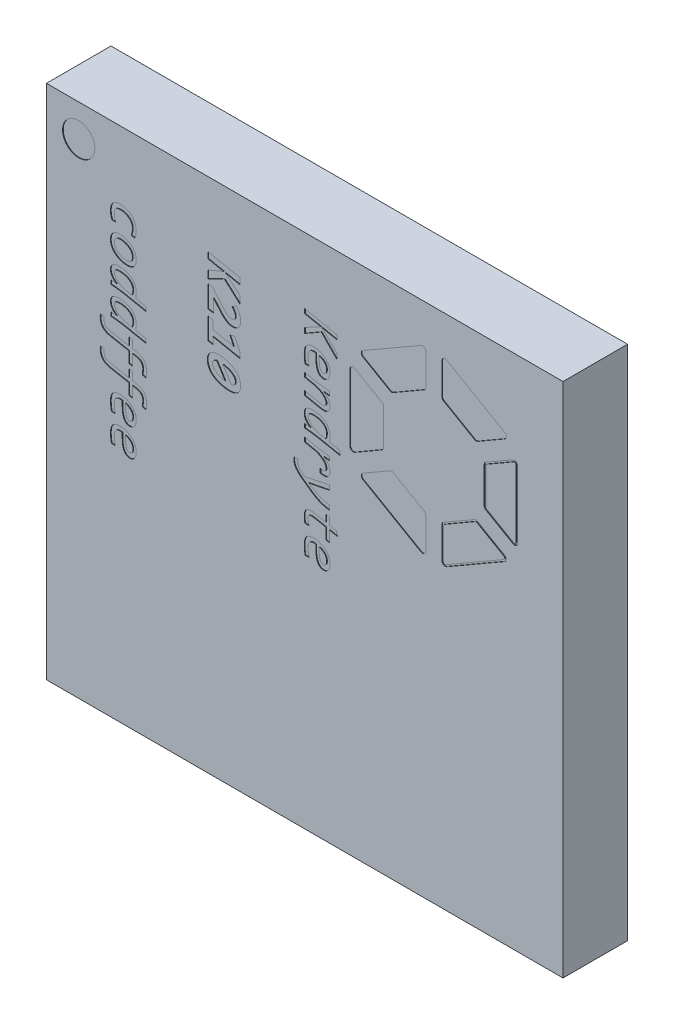
from build123d import *

# Parameters (mm, degrees)
SKETCH_1_W                      = 8
SKETCH_1_H                      = 8
EXTRUDE_1_DEPTH                 = 1
REVOLVE_1_ANGLE                 = 180
PATTERN_LINEAR_1_COUNT          = 12
PATTERN_LINEAR_1_PITCH          = 0.65
PATTERN_LINEAR_2_COUNT          = 12
PATTERN_LINEAR_2_PITCH          = 0.65
PATTERN_LINEAR_2_COPY_1_ANGLE   = 180
PATTERN_LINEAR_2_COPY_2_ANGLE   = 180
PATTERN_LINEAR_2_COPY_3_ANGLE   = 180
PATTERN_LINEAR_2_COPY_4_ANGLE   = 180
PATTERN_LINEAR_2_COPY_5_ANGLE   = 180
PATTERN_LINEAR_2_COPY_6_ANGLE   = 180
PATTERN_LINEAR_2_COPY_7_ANGLE   = 180
PATTERN_LINEAR_2_COPY_8_ANGLE   = 180
PATTERN_LINEAR_2_COPY_9_ANGLE   = 180
PATTERN_LINEAR_2_COPY_10_ANGLE  = 180
PATTERN_LINEAR_2_COPY_11_ANGLE  = 180
PATTERN_LINEAR_2_COPY_12_ANGLE  = 180
PATTERN_LINEAR_2_COPY_13_ANGLE  = 180
PATTERN_LINEAR_2_COPY_14_ANGLE  = 180
PATTERN_LINEAR_2_COPY_15_ANGLE  = 180
PATTERN_LINEAR_2_COPY_16_ANGLE  = 180
PATTERN_LINEAR_2_COPY_17_ANGLE  = 180
PATTERN_LINEAR_2_COPY_18_ANGLE  = 180
PATTERN_LINEAR_2_COPY_19_ANGLE  = 180
PATTERN_LINEAR_2_COPY_20_ANGLE  = 180
PATTERN_LINEAR_2_COPY_21_ANGLE  = 180
PATTERN_LINEAR_2_COPY_22_ANGLE  = 180
PATTERN_LINEAR_2_COPY_23_ANGLE  = 180
PATTERN_LINEAR_2_COPY_24_ANGLE  = 180
PATTERN_LINEAR_2_COPY_25_ANGLE  = 180
PATTERN_LINEAR_2_COPY_26_ANGLE  = 180
PATTERN_LINEAR_2_COPY_27_ANGLE  = 180
PATTERN_LINEAR_2_COPY_28_ANGLE  = 180
PATTERN_LINEAR_2_COPY_29_ANGLE  = 180
PATTERN_LINEAR_2_COPY_30_ANGLE  = 180
PATTERN_LINEAR_2_COPY_31_ANGLE  = 180
PATTERN_LINEAR_2_COPY_32_ANGLE  = 180
PATTERN_LINEAR_2_COPY_33_ANGLE  = 180
PATTERN_LINEAR_2_COPY_34_ANGLE  = 180
PATTERN_LINEAR_2_COPY_35_ANGLE  = 180
PATTERN_LINEAR_2_COPY_36_ANGLE  = 180
PATTERN_LINEAR_2_COPY_37_ANGLE  = 180
PATTERN_LINEAR_2_COPY_38_ANGLE  = 180
PATTERN_LINEAR_2_COPY_39_ANGLE  = 180
PATTERN_LINEAR_2_COPY_40_ANGLE  = 180
PATTERN_LINEAR_2_COPY_41_ANGLE  = 180
PATTERN_LINEAR_2_COPY_42_ANGLE  = 180
PATTERN_LINEAR_2_COPY_43_ANGLE  = 180
PATTERN_LINEAR_2_COPY_44_ANGLE  = 180
PATTERN_LINEAR_2_COPY_45_ANGLE  = 180
PATTERN_LINEAR_2_COPY_46_ANGLE  = 180
PATTERN_LINEAR_2_COPY_47_ANGLE  = 180
PATTERN_LINEAR_2_COPY_48_ANGLE  = 180
PATTERN_LINEAR_2_COPY_49_ANGLE  = 180
PATTERN_LINEAR_2_COPY_50_ANGLE  = 180
PATTERN_LINEAR_2_COPY_51_ANGLE  = 180
PATTERN_LINEAR_2_COPY_52_ANGLE  = 180
PATTERN_LINEAR_2_COPY_53_ANGLE  = 180
PATTERN_LINEAR_2_COPY_54_ANGLE  = 180
PATTERN_LINEAR_2_COPY_55_ANGLE  = 180
PATTERN_LINEAR_2_COPY_56_ANGLE  = 180
PATTERN_LINEAR_2_COPY_57_ANGLE  = 180
PATTERN_LINEAR_2_COPY_58_ANGLE  = 180
PATTERN_LINEAR_2_COPY_59_ANGLE  = 180
PATTERN_LINEAR_2_COPY_60_ANGLE  = 180
PATTERN_LINEAR_2_COPY_61_ANGLE  = 180
PATTERN_LINEAR_2_COPY_62_ANGLE  = 180
PATTERN_LINEAR_2_COPY_63_ANGLE  = 180
PATTERN_LINEAR_2_COPY_64_ANGLE  = 180
PATTERN_LINEAR_2_COPY_65_ANGLE  = 180
PATTERN_LINEAR_2_COPY_66_ANGLE  = 180
PATTERN_LINEAR_2_COPY_67_ANGLE  = 180
PATTERN_LINEAR_2_COPY_68_ANGLE  = 180
PATTERN_LINEAR_2_COPY_69_ANGLE  = 180
PATTERN_LINEAR_2_COPY_70_ANGLE  = 180
PATTERN_LINEAR_2_COPY_71_ANGLE  = 180
PATTERN_LINEAR_2_COPY_72_ANGLE  = 180
PATTERN_LINEAR_2_COPY_73_ANGLE  = 180
PATTERN_LINEAR_2_COPY_74_ANGLE  = 180
PATTERN_LINEAR_2_COPY_75_ANGLE  = 180
PATTERN_LINEAR_2_COPY_76_ANGLE  = 180
PATTERN_LINEAR_2_COPY_77_ANGLE  = 180
PATTERN_LINEAR_2_COPY_78_ANGLE  = 180
PATTERN_LINEAR_2_COPY_79_ANGLE  = 180
PATTERN_LINEAR_2_COPY_80_ANGLE  = 180
PATTERN_LINEAR_2_COPY_81_ANGLE  = 180
PATTERN_LINEAR_2_COPY_82_ANGLE  = 180
PATTERN_LINEAR_2_COPY_83_ANGLE  = 180
PATTERN_LINEAR_2_COPY_84_ANGLE  = 180
PATTERN_LINEAR_2_COPY_85_ANGLE  = 180
PATTERN_LINEAR_2_COPY_86_ANGLE  = 180
PATTERN_LINEAR_2_COPY_87_ANGLE  = 180
PATTERN_LINEAR_2_COPY_88_ANGLE  = 180
PATTERN_LINEAR_2_COPY_89_ANGLE  = 180
PATTERN_LINEAR_2_COPY_90_ANGLE  = 180
PATTERN_LINEAR_2_COPY_91_ANGLE  = 180
PATTERN_LINEAR_2_COPY_92_ANGLE  = 180
PATTERN_LINEAR_2_COPY_93_ANGLE  = 180
PATTERN_LINEAR_2_COPY_94_ANGLE  = 180
PATTERN_LINEAR_2_COPY_95_ANGLE  = 180
PATTERN_LINEAR_2_COPY_96_ANGLE  = 180
PATTERN_LINEAR_2_COPY_97_ANGLE  = 180
PATTERN_LINEAR_2_COPY_98_ANGLE  = 180
PATTERN_LINEAR_2_COPY_99_ANGLE  = 180
PATTERN_LINEAR_2_COPY_100_ANGLE = 180
PATTERN_LINEAR_2_COPY_101_ANGLE = 180
PATTERN_LINEAR_2_COPY_102_ANGLE = 180
PATTERN_LINEAR_2_COPY_103_ANGLE = 180
PATTERN_LINEAR_2_COPY_104_ANGLE = 180
PATTERN_LINEAR_2_COPY_105_ANGLE = 180
PATTERN_LINEAR_2_COPY_106_ANGLE = 180
PATTERN_LINEAR_2_COPY_107_ANGLE = 180
PATTERN_LINEAR_2_COPY_108_ANGLE = 180
PATTERN_LINEAR_2_COPY_109_ANGLE = 180
PATTERN_LINEAR_2_COPY_110_ANGLE = 180
PATTERN_LINEAR_2_COPY_111_ANGLE = 180
PATTERN_LINEAR_2_COPY_112_ANGLE = 180
PATTERN_LINEAR_2_COPY_113_ANGLE = 180
PATTERN_LINEAR_2_COPY_114_ANGLE = 180
PATTERN_LINEAR_2_COPY_115_ANGLE = 180
PATTERN_LINEAR_2_COPY_116_ANGLE = 180
PATTERN_LINEAR_2_COPY_117_ANGLE = 180
PATTERN_LINEAR_2_COPY_118_ANGLE = 180
PATTERN_LINEAR_2_COPY_119_ANGLE = 180
PATTERN_LINEAR_2_COPY_120_ANGLE = 180
PATTERN_LINEAR_2_COPY_121_ANGLE = 180
SKETCH_3_R                      = 0.25
CUT_EXTRUDE_1_DEPTH             = 0.01


with BuildPart() as part:
    # 草图1 → 凸台-拉伸1 (new body)
    with BuildSketch(Plane.XY.offset(0.15)):
        Rectangle(SKETCH_1_W, SKETCH_1_H)
    extrude(amount=EXTRUDE_1_DEPTH)

    # 草图2 → 旋转1 (revolve)
    with BuildSketch(Plane(origin=(0, 0, 0.15), x_dir=(-1, 0, 0), z_dir=(0, 0, -1))):
        with BuildLine():
            Line((-3.575, 3.725), (-3.575, 3.425))
            ThreePointArc((-3.575, 3.425), (-3.725, 3.575), (-3.575, 3.725))
        make_face()
    revolve_1 = revolve(axis=Axis((3.575, 3.725, 0.15), (0, 1, 0)), revolution_arc=REVOLVE_1_ANGLE)

    # 阵列(线性)1: 旋转1 ×12
    with Locations(*[(-i * PATTERN_LINEAR_1_PITCH, 0, 0) for i in range(1, PATTERN_LINEAR_1_COUNT)]):
        add(revolve_1)

    # 阵列(线性)2: 旋转1 ×12
    with Locations(*[(0, -i * PATTERN_LINEAR_2_PITCH, 0) for i in range(1, PATTERN_LINEAR_2_COUNT)]):
        add(revolve_1)

    # 阵列(线性)2 copy 1 sketch → 阵列(线性)2 copy 1 (revolve)
    with BuildSketch(Plane(origin=(-0.65, -0.65, 0.15), x_dir=(-1, 0, 0), z_dir=(0, 0, -1))):
        with BuildLine():
            Line((-3.575, 3.725), (-3.575, 3.425))
            ThreePointArc((-3.575, 3.425), (-3.725, 3.575), (-3.575, 3.725))
        make_face()
    revolve(axis=Axis((2.925, 3.075, 0.15), (0, 1, 0)), revolution_arc=PATTERN_LINEAR_2_COPY_1_ANGLE)

    # 阵列(线性)2 copy 2 sketch → 阵列(线性)2 copy 2 (revolve)
    with BuildSketch(Plane(origin=(-0.65, -1.3, 0.15), x_dir=(-1, 0, 0), z_dir=(0, 0, -1))):
        with BuildLine():
            Line((-3.575, 3.725), (-3.575, 3.425))
            ThreePointArc((-3.575, 3.425), (-3.725, 3.575), (-3.575, 3.725))
        make_face()
    revolve(axis=Axis((2.925, 2.425, 0.15), (0, 1, 0)), revolution_arc=PATTERN_LINEAR_2_COPY_2_ANGLE)

    # 阵列(线性)2 copy 3 sketch → 阵列(线性)2 copy 3 (revolve)
    with BuildSketch(Plane(origin=(-0.65, -1.95, 0.15), x_dir=(-1, 0, 0), z_dir=(0, 0, -1))):
        with BuildLine():
            Line((-3.575, 3.725), (-3.575, 3.425))
            ThreePointArc((-3.575, 3.425), (-3.725, 3.575), (-3.575, 3.725))
        make_face()
    revolve(axis=Axis((2.925, 1.775, 0.15), (0, 1, 0)), revolution_arc=PATTERN_LINEAR_2_COPY_3_ANGLE)

    # 阵列(线性)2 copy 4 sketch → 阵列(线性)2 copy 4 (revolve)
    with BuildSketch(Plane(origin=(-0.65, -2.6, 0.15), x_dir=(-1, 0, 0), z_dir=(0, 0, -1))):
        with BuildLine():
            Line((-3.575, 3.725), (-3.575, 3.425))
            ThreePointArc((-3.575, 3.425), (-3.725, 3.575), (-3.575, 3.725))
        make_face()
    revolve(axis=Axis((2.925, 1.125, 0.15), (0, 1, 0)), revolution_arc=PATTERN_LINEAR_2_COPY_4_ANGLE)

    # 阵列(线性)2 copy 5 sketch → 阵列(线性)2 copy 5 (revolve)
    with BuildSketch(Plane(origin=(-0.65, -3.25, 0.15), x_dir=(-1, 0, 0), z_dir=(0, 0, -1))):
        with BuildLine():
            Line((-3.575, 3.725), (-3.575, 3.425))
            ThreePointArc((-3.575, 3.425), (-3.725, 3.575), (-3.575, 3.725))
        make_face()
    revolve(axis=Axis((2.925, 0.475, 0.15), (0, 1, 0)), revolution_arc=PATTERN_LINEAR_2_COPY_5_ANGLE)

    # 阵列(线性)2 copy 6 sketch → 阵列(线性)2 copy 6 (revolve)
    with BuildSketch(Plane(origin=(-0.65, -3.9, 0.15), x_dir=(-1, 0, 0), z_dir=(0, 0, -1))):
        with BuildLine():
            Line((-3.575, 3.725), (-3.575, 3.425))
            ThreePointArc((-3.575, 3.425), (-3.725, 3.575), (-3.575, 3.725))
        make_face()
    revolve(axis=Axis((2.925, -0.175, 0.15), (0, 1, 0)), revolution_arc=PATTERN_LINEAR_2_COPY_6_ANGLE)

    # 阵列(线性)2 copy 7 sketch → 阵列(线性)2 copy 7 (revolve)
    with BuildSketch(Plane(origin=(-0.65, -4.55, 0.15), x_dir=(-1, 0, 0), z_dir=(0, 0, -1))):
        with BuildLine():
            Line((-3.575, 3.725), (-3.575, 3.425))
            ThreePointArc((-3.575, 3.425), (-3.725, 3.575), (-3.575, 3.725))
        make_face()
    revolve(axis=Axis((2.925, -0.825, 0.15), (0, 1, 0)), revolution_arc=PATTERN_LINEAR_2_COPY_7_ANGLE)

    # 阵列(线性)2 copy 8 sketch → 阵列(线性)2 copy 8 (revolve)
    with BuildSketch(Plane(origin=(-0.65, -5.2, 0.15), x_dir=(-1, 0, 0), z_dir=(0, 0, -1))):
        with BuildLine():
            Line((-3.575, 3.725), (-3.575, 3.425))
            ThreePointArc((-3.575, 3.425), (-3.725, 3.575), (-3.575, 3.725))
        make_face()
    revolve(axis=Axis((2.925, -1.475, 0.15), (0, 1, 0)), revolution_arc=PATTERN_LINEAR_2_COPY_8_ANGLE)

    # 阵列(线性)2 copy 9 sketch → 阵列(线性)2 copy 9 (revolve)
    with BuildSketch(Plane(origin=(-0.65, -5.85, 0.15), x_dir=(-1, 0, 0), z_dir=(0, 0, -1))):
        with BuildLine():
            Line((-3.575, 3.725), (-3.575, 3.425))
            ThreePointArc((-3.575, 3.425), (-3.725, 3.575), (-3.575, 3.725))
        make_face()
    revolve(axis=Axis((2.925, -2.125, 0.15), (0, 1, 0)), revolution_arc=PATTERN_LINEAR_2_COPY_9_ANGLE)

    # 阵列(线性)2 copy 10 sketch → 阵列(线性)2 copy 10 (revolve)
    with BuildSketch(Plane(origin=(-0.65, -6.5, 0.15), x_dir=(-1, 0, 0), z_dir=(0, 0, -1))):
        with BuildLine():
            Line((-3.575, 3.725), (-3.575, 3.425))
            ThreePointArc((-3.575, 3.425), (-3.725, 3.575), (-3.575, 3.725))
        make_face()
    revolve(axis=Axis((2.925, -2.775, 0.15), (0, 1, 0)), revolution_arc=PATTERN_LINEAR_2_COPY_10_ANGLE)

    # 阵列(线性)2 copy 11 sketch → 阵列(线性)2 copy 11 (revolve)
    with BuildSketch(Plane(origin=(-0.65, -7.15, 0.15), x_dir=(-1, 0, 0), z_dir=(0, 0, -1))):
        with BuildLine():
            Line((-3.575, 3.725), (-3.575, 3.425))
            ThreePointArc((-3.575, 3.425), (-3.725, 3.575), (-3.575, 3.725))
        make_face()
    revolve(axis=Axis((2.925, -3.425, 0.15), (0, 1, 0)), revolution_arc=PATTERN_LINEAR_2_COPY_11_ANGLE)

    # 阵列(线性)2 copy 12 sketch → 阵列(线性)2 copy 12 (revolve)
    with BuildSketch(Plane(origin=(-1.3, -0.65, 0.15), x_dir=(-1, 0, 0), z_dir=(0, 0, -1))):
        with BuildLine():
            Line((-3.575, 3.725), (-3.575, 3.425))
            ThreePointArc((-3.575, 3.425), (-3.725, 3.575), (-3.575, 3.725))
        make_face()
    revolve(axis=Axis((2.275, 3.075, 0.15), (0, 1, 0)), revolution_arc=PATTERN_LINEAR_2_COPY_12_ANGLE)

    # 阵列(线性)2 copy 13 sketch → 阵列(线性)2 copy 13 (revolve)
    with BuildSketch(Plane(origin=(-1.3, -1.3, 0.15), x_dir=(-1, 0, 0), z_dir=(0, 0, -1))):
        with BuildLine():
            Line((-3.575, 3.725), (-3.575, 3.425))
            ThreePointArc((-3.575, 3.425), (-3.725, 3.575), (-3.575, 3.725))
        make_face()
    revolve(axis=Axis((2.275, 2.425, 0.15), (0, 1, 0)), revolution_arc=PATTERN_LINEAR_2_COPY_13_ANGLE)

    # 阵列(线性)2 copy 14 sketch → 阵列(线性)2 copy 14 (revolve)
    with BuildSketch(Plane(origin=(-1.3, -1.95, 0.15), x_dir=(-1, 0, 0), z_dir=(0, 0, -1))):
        with BuildLine():
            Line((-3.575, 3.725), (-3.575, 3.425))
            ThreePointArc((-3.575, 3.425), (-3.725, 3.575), (-3.575, 3.725))
        make_face()
    revolve(axis=Axis((2.275, 1.775, 0.15), (0, 1, 0)), revolution_arc=PATTERN_LINEAR_2_COPY_14_ANGLE)

    # 阵列(线性)2 copy 15 sketch → 阵列(线性)2 copy 15 (revolve)
    with BuildSketch(Plane(origin=(-1.3, -2.6, 0.15), x_dir=(-1, 0, 0), z_dir=(0, 0, -1))):
        with BuildLine():
            Line((-3.575, 3.725), (-3.575, 3.425))
            ThreePointArc((-3.575, 3.425), (-3.725, 3.575), (-3.575, 3.725))
        make_face()
    revolve(axis=Axis((2.275, 1.125, 0.15), (0, 1, 0)), revolution_arc=PATTERN_LINEAR_2_COPY_15_ANGLE)

    # 阵列(线性)2 copy 16 sketch → 阵列(线性)2 copy 16 (revolve)
    with BuildSketch(Plane(origin=(-1.3, -3.25, 0.15), x_dir=(-1, 0, 0), z_dir=(0, 0, -1))):
        with BuildLine():
            Line((-3.575, 3.725), (-3.575, 3.425))
            ThreePointArc((-3.575, 3.425), (-3.725, 3.575), (-3.575, 3.725))
        make_face()
    revolve(axis=Axis((2.275, 0.475, 0.15), (0, 1, 0)), revolution_arc=PATTERN_LINEAR_2_COPY_16_ANGLE)

    # 阵列(线性)2 copy 17 sketch → 阵列(线性)2 copy 17 (revolve)
    with BuildSketch(Plane(origin=(-1.3, -3.9, 0.15), x_dir=(-1, 0, 0), z_dir=(0, 0, -1))):
        with BuildLine():
            Line((-3.575, 3.725), (-3.575, 3.425))
            ThreePointArc((-3.575, 3.425), (-3.725, 3.575), (-3.575, 3.725))
        make_face()
    revolve(axis=Axis((2.275, -0.175, 0.15), (0, 1, 0)), revolution_arc=PATTERN_LINEAR_2_COPY_17_ANGLE)

    # 阵列(线性)2 copy 18 sketch → 阵列(线性)2 copy 18 (revolve)
    with BuildSketch(Plane(origin=(-1.3, -4.55, 0.15), x_dir=(-1, 0, 0), z_dir=(0, 0, -1))):
        with BuildLine():
            Line((-3.575, 3.725), (-3.575, 3.425))
            ThreePointArc((-3.575, 3.425), (-3.725, 3.575), (-3.575, 3.725))
        make_face()
    revolve(axis=Axis((2.275, -0.825, 0.15), (0, 1, 0)), revolution_arc=PATTERN_LINEAR_2_COPY_18_ANGLE)

    # 阵列(线性)2 copy 19 sketch → 阵列(线性)2 copy 19 (revolve)
    with BuildSketch(Plane(origin=(-1.3, -5.2, 0.15), x_dir=(-1, 0, 0), z_dir=(0, 0, -1))):
        with BuildLine():
            Line((-3.575, 3.725), (-3.575, 3.425))
            ThreePointArc((-3.575, 3.425), (-3.725, 3.575), (-3.575, 3.725))
        make_face()
    revolve(axis=Axis((2.275, -1.475, 0.15), (0, 1, 0)), revolution_arc=PATTERN_LINEAR_2_COPY_19_ANGLE)

    # 阵列(线性)2 copy 20 sketch → 阵列(线性)2 copy 20 (revolve)
    with BuildSketch(Plane(origin=(-1.3, -5.85, 0.15), x_dir=(-1, 0, 0), z_dir=(0, 0, -1))):
        with BuildLine():
            Line((-3.575, 3.725), (-3.575, 3.425))
            ThreePointArc((-3.575, 3.425), (-3.725, 3.575), (-3.575, 3.725))
        make_face()
    revolve(axis=Axis((2.275, -2.125, 0.15), (0, 1, 0)), revolution_arc=PATTERN_LINEAR_2_COPY_20_ANGLE)

    # 阵列(线性)2 copy 21 sketch → 阵列(线性)2 copy 21 (revolve)
    with BuildSketch(Plane(origin=(-1.3, -6.5, 0.15), x_dir=(-1, 0, 0), z_dir=(0, 0, -1))):
        with BuildLine():
            Line((-3.575, 3.725), (-3.575, 3.425))
            ThreePointArc((-3.575, 3.425), (-3.725, 3.575), (-3.575, 3.725))
        make_face()
    revolve(axis=Axis((2.275, -2.775, 0.15), (0, 1, 0)), revolution_arc=PATTERN_LINEAR_2_COPY_21_ANGLE)

    # 阵列(线性)2 copy 22 sketch → 阵列(线性)2 copy 22 (revolve)
    with BuildSketch(Plane(origin=(-1.3, -7.15, 0.15), x_dir=(-1, 0, 0), z_dir=(0, 0, -1))):
        with BuildLine():
            Line((-3.575, 3.725), (-3.575, 3.425))
            ThreePointArc((-3.575, 3.425), (-3.725, 3.575), (-3.575, 3.725))
        make_face()
    revolve(axis=Axis((2.275, -3.425, 0.15), (0, 1, 0)), revolution_arc=PATTERN_LINEAR_2_COPY_22_ANGLE)

    # 阵列(线性)2 copy 23 sketch → 阵列(线性)2 copy 23 (revolve)
    with BuildSketch(Plane(origin=(-1.95, -0.65, 0.15), x_dir=(-1, 0, 0), z_dir=(0, 0, -1))):
        with BuildLine():
            Line((-3.575, 3.725), (-3.575, 3.425))
            ThreePointArc((-3.575, 3.425), (-3.725, 3.575), (-3.575, 3.725))
        make_face()
    revolve(axis=Axis((1.625, 3.075, 0.15), (0, 1, 0)), revolution_arc=PATTERN_LINEAR_2_COPY_23_ANGLE)

    # 阵列(线性)2 copy 24 sketch → 阵列(线性)2 copy 24 (revolve)
    with BuildSketch(Plane(origin=(-1.95, -1.3, 0.15), x_dir=(-1, 0, 0), z_dir=(0, 0, -1))):
        with BuildLine():
            Line((-3.575, 3.725), (-3.575, 3.425))
            ThreePointArc((-3.575, 3.425), (-3.725, 3.575), (-3.575, 3.725))
        make_face()
    revolve(axis=Axis((1.625, 2.425, 0.15), (0, 1, 0)), revolution_arc=PATTERN_LINEAR_2_COPY_24_ANGLE)

    # 阵列(线性)2 copy 25 sketch → 阵列(线性)2 copy 25 (revolve)
    with BuildSketch(Plane(origin=(-1.95, -1.95, 0.15), x_dir=(-1, 0, 0), z_dir=(0, 0, -1))):
        with BuildLine():
            Line((-3.575, 3.725), (-3.575, 3.425))
            ThreePointArc((-3.575, 3.425), (-3.725, 3.575), (-3.575, 3.725))
        make_face()
    revolve(axis=Axis((1.625, 1.775, 0.15), (0, 1, 0)), revolution_arc=PATTERN_LINEAR_2_COPY_25_ANGLE)

    # 阵列(线性)2 copy 26 sketch → 阵列(线性)2 copy 26 (revolve)
    with BuildSketch(Plane(origin=(-1.95, -2.6, 0.15), x_dir=(-1, 0, 0), z_dir=(0, 0, -1))):
        with BuildLine():
            Line((-3.575, 3.725), (-3.575, 3.425))
            ThreePointArc((-3.575, 3.425), (-3.725, 3.575), (-3.575, 3.725))
        make_face()
    revolve(axis=Axis((1.625, 1.125, 0.15), (0, 1, 0)), revolution_arc=PATTERN_LINEAR_2_COPY_26_ANGLE)

    # 阵列(线性)2 copy 27 sketch → 阵列(线性)2 copy 27 (revolve)
    with BuildSketch(Plane(origin=(-1.95, -3.25, 0.15), x_dir=(-1, 0, 0), z_dir=(0, 0, -1))):
        with BuildLine():
            Line((-3.575, 3.725), (-3.575, 3.425))
            ThreePointArc((-3.575, 3.425), (-3.725, 3.575), (-3.575, 3.725))
        make_face()
    revolve(axis=Axis((1.625, 0.475, 0.15), (0, 1, 0)), revolution_arc=PATTERN_LINEAR_2_COPY_27_ANGLE)

    # 阵列(线性)2 copy 28 sketch → 阵列(线性)2 copy 28 (revolve)
    with BuildSketch(Plane(origin=(-1.95, -3.9, 0.15), x_dir=(-1, 0, 0), z_dir=(0, 0, -1))):
        with BuildLine():
            Line((-3.575, 3.725), (-3.575, 3.425))
            ThreePointArc((-3.575, 3.425), (-3.725, 3.575), (-3.575, 3.725))
        make_face()
    revolve(axis=Axis((1.625, -0.175, 0.15), (0, 1, 0)), revolution_arc=PATTERN_LINEAR_2_COPY_28_ANGLE)

    # 阵列(线性)2 copy 29 sketch → 阵列(线性)2 copy 29 (revolve)
    with BuildSketch(Plane(origin=(-1.95, -4.55, 0.15), x_dir=(-1, 0, 0), z_dir=(0, 0, -1))):
        with BuildLine():
            Line((-3.575, 3.725), (-3.575, 3.425))
            ThreePointArc((-3.575, 3.425), (-3.725, 3.575), (-3.575, 3.725))
        make_face()
    revolve(axis=Axis((1.625, -0.825, 0.15), (0, 1, 0)), revolution_arc=PATTERN_LINEAR_2_COPY_29_ANGLE)

    # 阵列(线性)2 copy 30 sketch → 阵列(线性)2 copy 30 (revolve)
    with BuildSketch(Plane(origin=(-1.95, -5.2, 0.15), x_dir=(-1, 0, 0), z_dir=(0, 0, -1))):
        with BuildLine():
            Line((-3.575, 3.725), (-3.575, 3.425))
            ThreePointArc((-3.575, 3.425), (-3.725, 3.575), (-3.575, 3.725))
        make_face()
    revolve(axis=Axis((1.625, -1.475, 0.15), (0, 1, 0)), revolution_arc=PATTERN_LINEAR_2_COPY_30_ANGLE)

    # 阵列(线性)2 copy 31 sketch → 阵列(线性)2 copy 31 (revolve)
    with BuildSketch(Plane(origin=(-1.95, -5.85, 0.15), x_dir=(-1, 0, 0), z_dir=(0, 0, -1))):
        with BuildLine():
            Line((-3.575, 3.725), (-3.575, 3.425))
            ThreePointArc((-3.575, 3.425), (-3.725, 3.575), (-3.575, 3.725))
        make_face()
    revolve(axis=Axis((1.625, -2.125, 0.15), (0, 1, 0)), revolution_arc=PATTERN_LINEAR_2_COPY_31_ANGLE)

    # 阵列(线性)2 copy 32 sketch → 阵列(线性)2 copy 32 (revolve)
    with BuildSketch(Plane(origin=(-1.95, -6.5, 0.15), x_dir=(-1, 0, 0), z_dir=(0, 0, -1))):
        with BuildLine():
            Line((-3.575, 3.725), (-3.575, 3.425))
            ThreePointArc((-3.575, 3.425), (-3.725, 3.575), (-3.575, 3.725))
        make_face()
    revolve(axis=Axis((1.625, -2.775, 0.15), (0, 1, 0)), revolution_arc=PATTERN_LINEAR_2_COPY_32_ANGLE)

    # 阵列(线性)2 copy 33 sketch → 阵列(线性)2 copy 33 (revolve)
    with BuildSketch(Plane(origin=(-1.95, -7.15, 0.15), x_dir=(-1, 0, 0), z_dir=(0, 0, -1))):
        with BuildLine():
            Line((-3.575, 3.725), (-3.575, 3.425))
            ThreePointArc((-3.575, 3.425), (-3.725, 3.575), (-3.575, 3.725))
        make_face()
    revolve(axis=Axis((1.625, -3.425, 0.15), (0, 1, 0)), revolution_arc=PATTERN_LINEAR_2_COPY_33_ANGLE)

    # 阵列(线性)2 copy 34 sketch → 阵列(线性)2 copy 34 (revolve)
    with BuildSketch(Plane(origin=(-2.6, -0.65, 0.15), x_dir=(-1, 0, 0), z_dir=(0, 0, -1))):
        with BuildLine():
            Line((-3.575, 3.725), (-3.575, 3.425))
            ThreePointArc((-3.575, 3.425), (-3.725, 3.575), (-3.575, 3.725))
        make_face()
    revolve(axis=Axis((0.975, 3.075, 0.15), (0, 1, 0)), revolution_arc=PATTERN_LINEAR_2_COPY_34_ANGLE)

    # 阵列(线性)2 copy 35 sketch → 阵列(线性)2 copy 35 (revolve)
    with BuildSketch(Plane(origin=(-2.6, -1.3, 0.15), x_dir=(-1, 0, 0), z_dir=(0, 0, -1))):
        with BuildLine():
            Line((-3.575, 3.725), (-3.575, 3.425))
            ThreePointArc((-3.575, 3.425), (-3.725, 3.575), (-3.575, 3.725))
        make_face()
    revolve(axis=Axis((0.975, 2.425, 0.15), (0, 1, 0)), revolution_arc=PATTERN_LINEAR_2_COPY_35_ANGLE)

    # 阵列(线性)2 copy 36 sketch → 阵列(线性)2 copy 36 (revolve)
    with BuildSketch(Plane(origin=(-2.6, -1.95, 0.15), x_dir=(-1, 0, 0), z_dir=(0, 0, -1))):
        with BuildLine():
            Line((-3.575, 3.725), (-3.575, 3.425))
            ThreePointArc((-3.575, 3.425), (-3.725, 3.575), (-3.575, 3.725))
        make_face()
    revolve(axis=Axis((0.975, 1.775, 0.15), (0, 1, 0)), revolution_arc=PATTERN_LINEAR_2_COPY_36_ANGLE)

    # 阵列(线性)2 copy 37 sketch → 阵列(线性)2 copy 37 (revolve)
    with BuildSketch(Plane(origin=(-2.6, -2.6, 0.15), x_dir=(-1, 0, 0), z_dir=(0, 0, -1))):
        with BuildLine():
            Line((-3.575, 3.725), (-3.575, 3.425))
            ThreePointArc((-3.575, 3.425), (-3.725, 3.575), (-3.575, 3.725))
        make_face()
    revolve(axis=Axis((0.975, 1.125, 0.15), (0, 1, 0)), revolution_arc=PATTERN_LINEAR_2_COPY_37_ANGLE)

    # 阵列(线性)2 copy 38 sketch → 阵列(线性)2 copy 38 (revolve)
    with BuildSketch(Plane(origin=(-2.6, -3.25, 0.15), x_dir=(-1, 0, 0), z_dir=(0, 0, -1))):
        with BuildLine():
            Line((-3.575, 3.725), (-3.575, 3.425))
            ThreePointArc((-3.575, 3.425), (-3.725, 3.575), (-3.575, 3.725))
        make_face()
    revolve(axis=Axis((0.975, 0.475, 0.15), (0, 1, 0)), revolution_arc=PATTERN_LINEAR_2_COPY_38_ANGLE)

    # 阵列(线性)2 copy 39 sketch → 阵列(线性)2 copy 39 (revolve)
    with BuildSketch(Plane(origin=(-2.6, -3.9, 0.15), x_dir=(-1, 0, 0), z_dir=(0, 0, -1))):
        with BuildLine():
            Line((-3.575, 3.725), (-3.575, 3.425))
            ThreePointArc((-3.575, 3.425), (-3.725, 3.575), (-3.575, 3.725))
        make_face()
    revolve(axis=Axis((0.975, -0.175, 0.15), (0, 1, 0)), revolution_arc=PATTERN_LINEAR_2_COPY_39_ANGLE)

    # 阵列(线性)2 copy 40 sketch → 阵列(线性)2 copy 40 (revolve)
    with BuildSketch(Plane(origin=(-2.6, -4.55, 0.15), x_dir=(-1, 0, 0), z_dir=(0, 0, -1))):
        with BuildLine():
            Line((-3.575, 3.725), (-3.575, 3.425))
            ThreePointArc((-3.575, 3.425), (-3.725, 3.575), (-3.575, 3.725))
        make_face()
    revolve(axis=Axis((0.975, -0.825, 0.15), (0, 1, 0)), revolution_arc=PATTERN_LINEAR_2_COPY_40_ANGLE)

    # 阵列(线性)2 copy 41 sketch → 阵列(线性)2 copy 41 (revolve)
    with BuildSketch(Plane(origin=(-2.6, -5.2, 0.15), x_dir=(-1, 0, 0), z_dir=(0, 0, -1))):
        with BuildLine():
            Line((-3.575, 3.725), (-3.575, 3.425))
            ThreePointArc((-3.575, 3.425), (-3.725, 3.575), (-3.575, 3.725))
        make_face()
    revolve(axis=Axis((0.975, -1.475, 0.15), (0, 1, 0)), revolution_arc=PATTERN_LINEAR_2_COPY_41_ANGLE)

    # 阵列(线性)2 copy 42 sketch → 阵列(线性)2 copy 42 (revolve)
    with BuildSketch(Plane(origin=(-2.6, -5.85, 0.15), x_dir=(-1, 0, 0), z_dir=(0, 0, -1))):
        with BuildLine():
            Line((-3.575, 3.725), (-3.575, 3.425))
            ThreePointArc((-3.575, 3.425), (-3.725, 3.575), (-3.575, 3.725))
        make_face()
    revolve(axis=Axis((0.975, -2.125, 0.15), (0, 1, 0)), revolution_arc=PATTERN_LINEAR_2_COPY_42_ANGLE)

    # 阵列(线性)2 copy 43 sketch → 阵列(线性)2 copy 43 (revolve)
    with BuildSketch(Plane(origin=(-2.6, -6.5, 0.15), x_dir=(-1, 0, 0), z_dir=(0, 0, -1))):
        with BuildLine():
            Line((-3.575, 3.725), (-3.575, 3.425))
            ThreePointArc((-3.575, 3.425), (-3.725, 3.575), (-3.575, 3.725))
        make_face()
    revolve(axis=Axis((0.975, -2.775, 0.15), (0, 1, 0)), revolution_arc=PATTERN_LINEAR_2_COPY_43_ANGLE)

    # 阵列(线性)2 copy 44 sketch → 阵列(线性)2 copy 44 (revolve)
    with BuildSketch(Plane(origin=(-2.6, -7.15, 0.15), x_dir=(-1, 0, 0), z_dir=(0, 0, -1))):
        with BuildLine():
            Line((-3.575, 3.725), (-3.575, 3.425))
            ThreePointArc((-3.575, 3.425), (-3.725, 3.575), (-3.575, 3.725))
        make_face()
    revolve(axis=Axis((0.975, -3.425, 0.15), (0, 1, 0)), revolution_arc=PATTERN_LINEAR_2_COPY_44_ANGLE)

    # 阵列(线性)2 copy 45 sketch → 阵列(线性)2 copy 45 (revolve)
    with BuildSketch(Plane(origin=(-3.25, -0.65, 0.15), x_dir=(-1, 0, 0), z_dir=(0, 0, -1))):
        with BuildLine():
            Line((-3.575, 3.725), (-3.575, 3.425))
            ThreePointArc((-3.575, 3.425), (-3.725, 3.575), (-3.575, 3.725))
        make_face()
    revolve(axis=Axis((0.325, 3.075, 0.15), (0, 1, 0)), revolution_arc=PATTERN_LINEAR_2_COPY_45_ANGLE)

    # 阵列(线性)2 copy 46 sketch → 阵列(线性)2 copy 46 (revolve)
    with BuildSketch(Plane(origin=(-3.25, -1.3, 0.15), x_dir=(-1, 0, 0), z_dir=(0, 0, -1))):
        with BuildLine():
            Line((-3.575, 3.725), (-3.575, 3.425))
            ThreePointArc((-3.575, 3.425), (-3.725, 3.575), (-3.575, 3.725))
        make_face()
    revolve(axis=Axis((0.325, 2.425, 0.15), (0, 1, 0)), revolution_arc=PATTERN_LINEAR_2_COPY_46_ANGLE)

    # 阵列(线性)2 copy 47 sketch → 阵列(线性)2 copy 47 (revolve)
    with BuildSketch(Plane(origin=(-3.25, -1.95, 0.15), x_dir=(-1, 0, 0), z_dir=(0, 0, -1))):
        with BuildLine():
            Line((-3.575, 3.725), (-3.575, 3.425))
            ThreePointArc((-3.575, 3.425), (-3.725, 3.575), (-3.575, 3.725))
        make_face()
    revolve(axis=Axis((0.325, 1.775, 0.15), (0, 1, 0)), revolution_arc=PATTERN_LINEAR_2_COPY_47_ANGLE)

    # 阵列(线性)2 copy 48 sketch → 阵列(线性)2 copy 48 (revolve)
    with BuildSketch(Plane(origin=(-3.25, -2.6, 0.15), x_dir=(-1, 0, 0), z_dir=(0, 0, -1))):
        with BuildLine():
            Line((-3.575, 3.725), (-3.575, 3.425))
            ThreePointArc((-3.575, 3.425), (-3.725, 3.575), (-3.575, 3.725))
        make_face()
    revolve(axis=Axis((0.325, 1.125, 0.15), (0, 1, 0)), revolution_arc=PATTERN_LINEAR_2_COPY_48_ANGLE)

    # 阵列(线性)2 copy 49 sketch → 阵列(线性)2 copy 49 (revolve)
    with BuildSketch(Plane(origin=(-3.25, -3.25, 0.15), x_dir=(-1, 0, 0), z_dir=(0, 0, -1))):
        with BuildLine():
            Line((-3.575, 3.725), (-3.575, 3.425))
            ThreePointArc((-3.575, 3.425), (-3.725, 3.575), (-3.575, 3.725))
        make_face()
    revolve(axis=Axis((0.325, 0.475, 0.15), (0, 1, 0)), revolution_arc=PATTERN_LINEAR_2_COPY_49_ANGLE)

    # 阵列(线性)2 copy 50 sketch → 阵列(线性)2 copy 50 (revolve)
    with BuildSketch(Plane(origin=(-3.25, -3.9, 0.15), x_dir=(-1, 0, 0), z_dir=(0, 0, -1))):
        with BuildLine():
            Line((-3.575, 3.725), (-3.575, 3.425))
            ThreePointArc((-3.575, 3.425), (-3.725, 3.575), (-3.575, 3.725))
        make_face()
    revolve(axis=Axis((0.325, -0.175, 0.15), (0, 1, 0)), revolution_arc=PATTERN_LINEAR_2_COPY_50_ANGLE)

    # 阵列(线性)2 copy 51 sketch → 阵列(线性)2 copy 51 (revolve)
    with BuildSketch(Plane(origin=(-3.25, -4.55, 0.15), x_dir=(-1, 0, 0), z_dir=(0, 0, -1))):
        with BuildLine():
            Line((-3.575, 3.725), (-3.575, 3.425))
            ThreePointArc((-3.575, 3.425), (-3.725, 3.575), (-3.575, 3.725))
        make_face()
    revolve(axis=Axis((0.325, -0.825, 0.15), (0, 1, 0)), revolution_arc=PATTERN_LINEAR_2_COPY_51_ANGLE)

    # 阵列(线性)2 copy 52 sketch → 阵列(线性)2 copy 52 (revolve)
    with BuildSketch(Plane(origin=(-3.25, -5.2, 0.15), x_dir=(-1, 0, 0), z_dir=(0, 0, -1))):
        with BuildLine():
            Line((-3.575, 3.725), (-3.575, 3.425))
            ThreePointArc((-3.575, 3.425), (-3.725, 3.575), (-3.575, 3.725))
        make_face()
    revolve(axis=Axis((0.325, -1.475, 0.15), (0, 1, 0)), revolution_arc=PATTERN_LINEAR_2_COPY_52_ANGLE)

    # 阵列(线性)2 copy 53 sketch → 阵列(线性)2 copy 53 (revolve)
    with BuildSketch(Plane(origin=(-3.25, -5.85, 0.15), x_dir=(-1, 0, 0), z_dir=(0, 0, -1))):
        with BuildLine():
            Line((-3.575, 3.725), (-3.575, 3.425))
            ThreePointArc((-3.575, 3.425), (-3.725, 3.575), (-3.575, 3.725))
        make_face()
    revolve(axis=Axis((0.325, -2.125, 0.15), (0, 1, 0)), revolution_arc=PATTERN_LINEAR_2_COPY_53_ANGLE)

    # 阵列(线性)2 copy 54 sketch → 阵列(线性)2 copy 54 (revolve)
    with BuildSketch(Plane(origin=(-3.25, -6.5, 0.15), x_dir=(-1, 0, 0), z_dir=(0, 0, -1))):
        with BuildLine():
            Line((-3.575, 3.725), (-3.575, 3.425))
            ThreePointArc((-3.575, 3.425), (-3.725, 3.575), (-3.575, 3.725))
        make_face()
    revolve(axis=Axis((0.325, -2.775, 0.15), (0, 1, 0)), revolution_arc=PATTERN_LINEAR_2_COPY_54_ANGLE)

    # 阵列(线性)2 copy 55 sketch → 阵列(线性)2 copy 55 (revolve)
    with BuildSketch(Plane(origin=(-3.25, -7.15, 0.15), x_dir=(-1, 0, 0), z_dir=(0, 0, -1))):
        with BuildLine():
            Line((-3.575, 3.725), (-3.575, 3.425))
            ThreePointArc((-3.575, 3.425), (-3.725, 3.575), (-3.575, 3.725))
        make_face()
    revolve(axis=Axis((0.325, -3.425, 0.15), (0, 1, 0)), revolution_arc=PATTERN_LINEAR_2_COPY_55_ANGLE)

    # 阵列(线性)2 copy 56 sketch → 阵列(线性)2 copy 56 (revolve)
    with BuildSketch(Plane(origin=(-3.9, -0.65, 0.15), x_dir=(-1, 0, 0), z_dir=(0, 0, -1))):
        with BuildLine():
            Line((-3.575, 3.725), (-3.575, 3.425))
            ThreePointArc((-3.575, 3.425), (-3.725, 3.575), (-3.575, 3.725))
        make_face()
    revolve(axis=Axis((-0.325, 3.075, 0.15), (0, 1, 0)), revolution_arc=PATTERN_LINEAR_2_COPY_56_ANGLE)

    # 阵列(线性)2 copy 57 sketch → 阵列(线性)2 copy 57 (revolve)
    with BuildSketch(Plane(origin=(-3.9, -1.3, 0.15), x_dir=(-1, 0, 0), z_dir=(0, 0, -1))):
        with BuildLine():
            Line((-3.575, 3.725), (-3.575, 3.425))
            ThreePointArc((-3.575, 3.425), (-3.725, 3.575), (-3.575, 3.725))
        make_face()
    revolve(axis=Axis((-0.325, 2.425, 0.15), (0, 1, 0)), revolution_arc=PATTERN_LINEAR_2_COPY_57_ANGLE)

    # 阵列(线性)2 copy 58 sketch → 阵列(线性)2 copy 58 (revolve)
    with BuildSketch(Plane(origin=(-3.9, -1.95, 0.15), x_dir=(-1, 0, 0), z_dir=(0, 0, -1))):
        with BuildLine():
            Line((-3.575, 3.725), (-3.575, 3.425))
            ThreePointArc((-3.575, 3.425), (-3.725, 3.575), (-3.575, 3.725))
        make_face()
    revolve(axis=Axis((-0.325, 1.775, 0.15), (0, 1, 0)), revolution_arc=PATTERN_LINEAR_2_COPY_58_ANGLE)

    # 阵列(线性)2 copy 59 sketch → 阵列(线性)2 copy 59 (revolve)
    with BuildSketch(Plane(origin=(-3.9, -2.6, 0.15), x_dir=(-1, 0, 0), z_dir=(0, 0, -1))):
        with BuildLine():
            Line((-3.575, 3.725), (-3.575, 3.425))
            ThreePointArc((-3.575, 3.425), (-3.725, 3.575), (-3.575, 3.725))
        make_face()
    revolve(axis=Axis((-0.325, 1.125, 0.15), (0, 1, 0)), revolution_arc=PATTERN_LINEAR_2_COPY_59_ANGLE)

    # 阵列(线性)2 copy 60 sketch → 阵列(线性)2 copy 60 (revolve)
    with BuildSketch(Plane(origin=(-3.9, -3.25, 0.15), x_dir=(-1, 0, 0), z_dir=(0, 0, -1))):
        with BuildLine():
            Line((-3.575, 3.725), (-3.575, 3.425))
            ThreePointArc((-3.575, 3.425), (-3.725, 3.575), (-3.575, 3.725))
        make_face()
    revolve(axis=Axis((-0.325, 0.475, 0.15), (0, 1, 0)), revolution_arc=PATTERN_LINEAR_2_COPY_60_ANGLE)

    # 阵列(线性)2 copy 61 sketch → 阵列(线性)2 copy 61 (revolve)
    with BuildSketch(Plane(origin=(-3.9, -3.9, 0.15), x_dir=(-1, 0, 0), z_dir=(0, 0, -1))):
        with BuildLine():
            Line((-3.575, 3.725), (-3.575, 3.425))
            ThreePointArc((-3.575, 3.425), (-3.725, 3.575), (-3.575, 3.725))
        make_face()
    revolve(axis=Axis((-0.325, -0.175, 0.15), (0, 1, 0)), revolution_arc=PATTERN_LINEAR_2_COPY_61_ANGLE)

    # 阵列(线性)2 copy 62 sketch → 阵列(线性)2 copy 62 (revolve)
    with BuildSketch(Plane(origin=(-3.9, -4.55, 0.15), x_dir=(-1, 0, 0), z_dir=(0, 0, -1))):
        with BuildLine():
            Line((-3.575, 3.725), (-3.575, 3.425))
            ThreePointArc((-3.575, 3.425), (-3.725, 3.575), (-3.575, 3.725))
        make_face()
    revolve(axis=Axis((-0.325, -0.825, 0.15), (0, 1, 0)), revolution_arc=PATTERN_LINEAR_2_COPY_62_ANGLE)

    # 阵列(线性)2 copy 63 sketch → 阵列(线性)2 copy 63 (revolve)
    with BuildSketch(Plane(origin=(-3.9, -5.2, 0.15), x_dir=(-1, 0, 0), z_dir=(0, 0, -1))):
        with BuildLine():
            Line((-3.575, 3.725), (-3.575, 3.425))
            ThreePointArc((-3.575, 3.425), (-3.725, 3.575), (-3.575, 3.725))
        make_face()
    revolve(axis=Axis((-0.325, -1.475, 0.15), (0, 1, 0)), revolution_arc=PATTERN_LINEAR_2_COPY_63_ANGLE)

    # 阵列(线性)2 copy 64 sketch → 阵列(线性)2 copy 64 (revolve)
    with BuildSketch(Plane(origin=(-3.9, -5.85, 0.15), x_dir=(-1, 0, 0), z_dir=(0, 0, -1))):
        with BuildLine():
            Line((-3.575, 3.725), (-3.575, 3.425))
            ThreePointArc((-3.575, 3.425), (-3.725, 3.575), (-3.575, 3.725))
        make_face()
    revolve(axis=Axis((-0.325, -2.125, 0.15), (0, 1, 0)), revolution_arc=PATTERN_LINEAR_2_COPY_64_ANGLE)

    # 阵列(线性)2 copy 65 sketch → 阵列(线性)2 copy 65 (revolve)
    with BuildSketch(Plane(origin=(-3.9, -6.5, 0.15), x_dir=(-1, 0, 0), z_dir=(0, 0, -1))):
        with BuildLine():
            Line((-3.575, 3.725), (-3.575, 3.425))
            ThreePointArc((-3.575, 3.425), (-3.725, 3.575), (-3.575, 3.725))
        make_face()
    revolve(axis=Axis((-0.325, -2.775, 0.15), (0, 1, 0)), revolution_arc=PATTERN_LINEAR_2_COPY_65_ANGLE)

    # 阵列(线性)2 copy 66 sketch → 阵列(线性)2 copy 66 (revolve)
    with BuildSketch(Plane(origin=(-3.9, -7.15, 0.15), x_dir=(-1, 0, 0), z_dir=(0, 0, -1))):
        with BuildLine():
            Line((-3.575, 3.725), (-3.575, 3.425))
            ThreePointArc((-3.575, 3.425), (-3.725, 3.575), (-3.575, 3.725))
        make_face()
    revolve(axis=Axis((-0.325, -3.425, 0.15), (0, 1, 0)), revolution_arc=PATTERN_LINEAR_2_COPY_66_ANGLE)

    # 阵列(线性)2 copy 67 sketch → 阵列(线性)2 copy 67 (revolve)
    with BuildSketch(Plane(origin=(-4.55, -0.65, 0.15), x_dir=(-1, 0, 0), z_dir=(0, 0, -1))):
        with BuildLine():
            Line((-3.575, 3.725), (-3.575, 3.425))
            ThreePointArc((-3.575, 3.425), (-3.725, 3.575), (-3.575, 3.725))
        make_face()
    revolve(axis=Axis((-0.975, 3.075, 0.15), (0, 1, 0)), revolution_arc=PATTERN_LINEAR_2_COPY_67_ANGLE)

    # 阵列(线性)2 copy 68 sketch → 阵列(线性)2 copy 68 (revolve)
    with BuildSketch(Plane(origin=(-4.55, -1.3, 0.15), x_dir=(-1, 0, 0), z_dir=(0, 0, -1))):
        with BuildLine():
            Line((-3.575, 3.725), (-3.575, 3.425))
            ThreePointArc((-3.575, 3.425), (-3.725, 3.575), (-3.575, 3.725))
        make_face()
    revolve(axis=Axis((-0.975, 2.425, 0.15), (0, 1, 0)), revolution_arc=PATTERN_LINEAR_2_COPY_68_ANGLE)

    # 阵列(线性)2 copy 69 sketch → 阵列(线性)2 copy 69 (revolve)
    with BuildSketch(Plane(origin=(-4.55, -1.95, 0.15), x_dir=(-1, 0, 0), z_dir=(0, 0, -1))):
        with BuildLine():
            Line((-3.575, 3.725), (-3.575, 3.425))
            ThreePointArc((-3.575, 3.425), (-3.725, 3.575), (-3.575, 3.725))
        make_face()
    revolve(axis=Axis((-0.975, 1.775, 0.15), (0, 1, 0)), revolution_arc=PATTERN_LINEAR_2_COPY_69_ANGLE)

    # 阵列(线性)2 copy 70 sketch → 阵列(线性)2 copy 70 (revolve)
    with BuildSketch(Plane(origin=(-4.55, -2.6, 0.15), x_dir=(-1, 0, 0), z_dir=(0, 0, -1))):
        with BuildLine():
            Line((-3.575, 3.725), (-3.575, 3.425))
            ThreePointArc((-3.575, 3.425), (-3.725, 3.575), (-3.575, 3.725))
        make_face()
    revolve(axis=Axis((-0.975, 1.125, 0.15), (0, 1, 0)), revolution_arc=PATTERN_LINEAR_2_COPY_70_ANGLE)

    # 阵列(线性)2 copy 71 sketch → 阵列(线性)2 copy 71 (revolve)
    with BuildSketch(Plane(origin=(-4.55, -3.25, 0.15), x_dir=(-1, 0, 0), z_dir=(0, 0, -1))):
        with BuildLine():
            Line((-3.575, 3.725), (-3.575, 3.425))
            ThreePointArc((-3.575, 3.425), (-3.725, 3.575), (-3.575, 3.725))
        make_face()
    revolve(axis=Axis((-0.975, 0.475, 0.15), (0, 1, 0)), revolution_arc=PATTERN_LINEAR_2_COPY_71_ANGLE)

    # 阵列(线性)2 copy 72 sketch → 阵列(线性)2 copy 72 (revolve)
    with BuildSketch(Plane(origin=(-4.55, -3.9, 0.15), x_dir=(-1, 0, 0), z_dir=(0, 0, -1))):
        with BuildLine():
            Line((-3.575, 3.725), (-3.575, 3.425))
            ThreePointArc((-3.575, 3.425), (-3.725, 3.575), (-3.575, 3.725))
        make_face()
    revolve(axis=Axis((-0.975, -0.175, 0.15), (0, 1, 0)), revolution_arc=PATTERN_LINEAR_2_COPY_72_ANGLE)

    # 阵列(线性)2 copy 73 sketch → 阵列(线性)2 copy 73 (revolve)
    with BuildSketch(Plane(origin=(-4.55, -4.55, 0.15), x_dir=(-1, 0, 0), z_dir=(0, 0, -1))):
        with BuildLine():
            Line((-3.575, 3.725), (-3.575, 3.425))
            ThreePointArc((-3.575, 3.425), (-3.725, 3.575), (-3.575, 3.725))
        make_face()
    revolve(axis=Axis((-0.975, -0.825, 0.15), (0, 1, 0)), revolution_arc=PATTERN_LINEAR_2_COPY_73_ANGLE)

    # 阵列(线性)2 copy 74 sketch → 阵列(线性)2 copy 74 (revolve)
    with BuildSketch(Plane(origin=(-4.55, -5.2, 0.15), x_dir=(-1, 0, 0), z_dir=(0, 0, -1))):
        with BuildLine():
            Line((-3.575, 3.725), (-3.575, 3.425))
            ThreePointArc((-3.575, 3.425), (-3.725, 3.575), (-3.575, 3.725))
        make_face()
    revolve(axis=Axis((-0.975, -1.475, 0.15), (0, 1, 0)), revolution_arc=PATTERN_LINEAR_2_COPY_74_ANGLE)

    # 阵列(线性)2 copy 75 sketch → 阵列(线性)2 copy 75 (revolve)
    with BuildSketch(Plane(origin=(-4.55, -5.85, 0.15), x_dir=(-1, 0, 0), z_dir=(0, 0, -1))):
        with BuildLine():
            Line((-3.575, 3.725), (-3.575, 3.425))
            ThreePointArc((-3.575, 3.425), (-3.725, 3.575), (-3.575, 3.725))
        make_face()
    revolve(axis=Axis((-0.975, -2.125, 0.15), (0, 1, 0)), revolution_arc=PATTERN_LINEAR_2_COPY_75_ANGLE)

    # 阵列(线性)2 copy 76 sketch → 阵列(线性)2 copy 76 (revolve)
    with BuildSketch(Plane(origin=(-4.55, -6.5, 0.15), x_dir=(-1, 0, 0), z_dir=(0, 0, -1))):
        with BuildLine():
            Line((-3.575, 3.725), (-3.575, 3.425))
            ThreePointArc((-3.575, 3.425), (-3.725, 3.575), (-3.575, 3.725))
        make_face()
    revolve(axis=Axis((-0.975, -2.775, 0.15), (0, 1, 0)), revolution_arc=PATTERN_LINEAR_2_COPY_76_ANGLE)

    # 阵列(线性)2 copy 77 sketch → 阵列(线性)2 copy 77 (revolve)
    with BuildSketch(Plane(origin=(-4.55, -7.15, 0.15), x_dir=(-1, 0, 0), z_dir=(0, 0, -1))):
        with BuildLine():
            Line((-3.575, 3.725), (-3.575, 3.425))
            ThreePointArc((-3.575, 3.425), (-3.725, 3.575), (-3.575, 3.725))
        make_face()
    revolve(axis=Axis((-0.975, -3.425, 0.15), (0, 1, 0)), revolution_arc=PATTERN_LINEAR_2_COPY_77_ANGLE)

    # 阵列(线性)2 copy 78 sketch → 阵列(线性)2 copy 78 (revolve)
    with BuildSketch(Plane(origin=(-5.2, -0.65, 0.15), x_dir=(-1, 0, 0), z_dir=(0, 0, -1))):
        with BuildLine():
            Line((-3.575, 3.725), (-3.575, 3.425))
            ThreePointArc((-3.575, 3.425), (-3.725, 3.575), (-3.575, 3.725))
        make_face()
    revolve(axis=Axis((-1.625, 3.075, 0.15), (0, 1, 0)), revolution_arc=PATTERN_LINEAR_2_COPY_78_ANGLE)

    # 阵列(线性)2 copy 79 sketch → 阵列(线性)2 copy 79 (revolve)
    with BuildSketch(Plane(origin=(-5.2, -1.3, 0.15), x_dir=(-1, 0, 0), z_dir=(0, 0, -1))):
        with BuildLine():
            Line((-3.575, 3.725), (-3.575, 3.425))
            ThreePointArc((-3.575, 3.425), (-3.725, 3.575), (-3.575, 3.725))
        make_face()
    revolve(axis=Axis((-1.625, 2.425, 0.15), (0, 1, 0)), revolution_arc=PATTERN_LINEAR_2_COPY_79_ANGLE)

    # 阵列(线性)2 copy 80 sketch → 阵列(线性)2 copy 80 (revolve)
    with BuildSketch(Plane(origin=(-5.2, -1.95, 0.15), x_dir=(-1, 0, 0), z_dir=(0, 0, -1))):
        with BuildLine():
            Line((-3.575, 3.725), (-3.575, 3.425))
            ThreePointArc((-3.575, 3.425), (-3.725, 3.575), (-3.575, 3.725))
        make_face()
    revolve(axis=Axis((-1.625, 1.775, 0.15), (0, 1, 0)), revolution_arc=PATTERN_LINEAR_2_COPY_80_ANGLE)

    # 阵列(线性)2 copy 81 sketch → 阵列(线性)2 copy 81 (revolve)
    with BuildSketch(Plane(origin=(-5.2, -2.6, 0.15), x_dir=(-1, 0, 0), z_dir=(0, 0, -1))):
        with BuildLine():
            Line((-3.575, 3.725), (-3.575, 3.425))
            ThreePointArc((-3.575, 3.425), (-3.725, 3.575), (-3.575, 3.725))
        make_face()
    revolve(axis=Axis((-1.625, 1.125, 0.15), (0, 1, 0)), revolution_arc=PATTERN_LINEAR_2_COPY_81_ANGLE)

    # 阵列(线性)2 copy 82 sketch → 阵列(线性)2 copy 82 (revolve)
    with BuildSketch(Plane(origin=(-5.2, -3.25, 0.15), x_dir=(-1, 0, 0), z_dir=(0, 0, -1))):
        with BuildLine():
            Line((-3.575, 3.725), (-3.575, 3.425))
            ThreePointArc((-3.575, 3.425), (-3.725, 3.575), (-3.575, 3.725))
        make_face()
    revolve(axis=Axis((-1.625, 0.475, 0.15), (0, 1, 0)), revolution_arc=PATTERN_LINEAR_2_COPY_82_ANGLE)

    # 阵列(线性)2 copy 83 sketch → 阵列(线性)2 copy 83 (revolve)
    with BuildSketch(Plane(origin=(-5.2, -3.9, 0.15), x_dir=(-1, 0, 0), z_dir=(0, 0, -1))):
        with BuildLine():
            Line((-3.575, 3.725), (-3.575, 3.425))
            ThreePointArc((-3.575, 3.425), (-3.725, 3.575), (-3.575, 3.725))
        make_face()
    revolve(axis=Axis((-1.625, -0.175, 0.15), (0, 1, 0)), revolution_arc=PATTERN_LINEAR_2_COPY_83_ANGLE)

    # 阵列(线性)2 copy 84 sketch → 阵列(线性)2 copy 84 (revolve)
    with BuildSketch(Plane(origin=(-5.2, -4.55, 0.15), x_dir=(-1, 0, 0), z_dir=(0, 0, -1))):
        with BuildLine():
            Line((-3.575, 3.725), (-3.575, 3.425))
            ThreePointArc((-3.575, 3.425), (-3.725, 3.575), (-3.575, 3.725))
        make_face()
    revolve(axis=Axis((-1.625, -0.825, 0.15), (0, 1, 0)), revolution_arc=PATTERN_LINEAR_2_COPY_84_ANGLE)

    # 阵列(线性)2 copy 85 sketch → 阵列(线性)2 copy 85 (revolve)
    with BuildSketch(Plane(origin=(-5.2, -5.2, 0.15), x_dir=(-1, 0, 0), z_dir=(0, 0, -1))):
        with BuildLine():
            Line((-3.575, 3.725), (-3.575, 3.425))
            ThreePointArc((-3.575, 3.425), (-3.725, 3.575), (-3.575, 3.725))
        make_face()
    revolve(axis=Axis((-1.625, -1.475, 0.15), (0, 1, 0)), revolution_arc=PATTERN_LINEAR_2_COPY_85_ANGLE)

    # 阵列(线性)2 copy 86 sketch → 阵列(线性)2 copy 86 (revolve)
    with BuildSketch(Plane(origin=(-5.2, -5.85, 0.15), x_dir=(-1, 0, 0), z_dir=(0, 0, -1))):
        with BuildLine():
            Line((-3.575, 3.725), (-3.575, 3.425))
            ThreePointArc((-3.575, 3.425), (-3.725, 3.575), (-3.575, 3.725))
        make_face()
    revolve(axis=Axis((-1.625, -2.125, 0.15), (0, 1, 0)), revolution_arc=PATTERN_LINEAR_2_COPY_86_ANGLE)

    # 阵列(线性)2 copy 87 sketch → 阵列(线性)2 copy 87 (revolve)
    with BuildSketch(Plane(origin=(-5.2, -6.5, 0.15), x_dir=(-1, 0, 0), z_dir=(0, 0, -1))):
        with BuildLine():
            Line((-3.575, 3.725), (-3.575, 3.425))
            ThreePointArc((-3.575, 3.425), (-3.725, 3.575), (-3.575, 3.725))
        make_face()
    revolve(axis=Axis((-1.625, -2.775, 0.15), (0, 1, 0)), revolution_arc=PATTERN_LINEAR_2_COPY_87_ANGLE)

    # 阵列(线性)2 copy 88 sketch → 阵列(线性)2 copy 88 (revolve)
    with BuildSketch(Plane(origin=(-5.2, -7.15, 0.15), x_dir=(-1, 0, 0), z_dir=(0, 0, -1))):
        with BuildLine():
            Line((-3.575, 3.725), (-3.575, 3.425))
            ThreePointArc((-3.575, 3.425), (-3.725, 3.575), (-3.575, 3.725))
        make_face()
    revolve(axis=Axis((-1.625, -3.425, 0.15), (0, 1, 0)), revolution_arc=PATTERN_LINEAR_2_COPY_88_ANGLE)

    # 阵列(线性)2 copy 89 sketch → 阵列(线性)2 copy 89 (revolve)
    with BuildSketch(Plane(origin=(-5.85, -0.65, 0.15), x_dir=(-1, 0, 0), z_dir=(0, 0, -1))):
        with BuildLine():
            Line((-3.575, 3.725), (-3.575, 3.425))
            ThreePointArc((-3.575, 3.425), (-3.725, 3.575), (-3.575, 3.725))
        make_face()
    revolve(axis=Axis((-2.275, 3.075, 0.15), (0, 1, 0)), revolution_arc=PATTERN_LINEAR_2_COPY_89_ANGLE)

    # 阵列(线性)2 copy 90 sketch → 阵列(线性)2 copy 90 (revolve)
    with BuildSketch(Plane(origin=(-5.85, -1.3, 0.15), x_dir=(-1, 0, 0), z_dir=(0, 0, -1))):
        with BuildLine():
            Line((-3.575, 3.725), (-3.575, 3.425))
            ThreePointArc((-3.575, 3.425), (-3.725, 3.575), (-3.575, 3.725))
        make_face()
    revolve(axis=Axis((-2.275, 2.425, 0.15), (0, 1, 0)), revolution_arc=PATTERN_LINEAR_2_COPY_90_ANGLE)

    # 阵列(线性)2 copy 91 sketch → 阵列(线性)2 copy 91 (revolve)
    with BuildSketch(Plane(origin=(-5.85, -1.95, 0.15), x_dir=(-1, 0, 0), z_dir=(0, 0, -1))):
        with BuildLine():
            Line((-3.575, 3.725), (-3.575, 3.425))
            ThreePointArc((-3.575, 3.425), (-3.725, 3.575), (-3.575, 3.725))
        make_face()
    revolve(axis=Axis((-2.275, 1.775, 0.15), (0, 1, 0)), revolution_arc=PATTERN_LINEAR_2_COPY_91_ANGLE)

    # 阵列(线性)2 copy 92 sketch → 阵列(线性)2 copy 92 (revolve)
    with BuildSketch(Plane(origin=(-5.85, -2.6, 0.15), x_dir=(-1, 0, 0), z_dir=(0, 0, -1))):
        with BuildLine():
            Line((-3.575, 3.725), (-3.575, 3.425))
            ThreePointArc((-3.575, 3.425), (-3.725, 3.575), (-3.575, 3.725))
        make_face()
    revolve(axis=Axis((-2.275, 1.125, 0.15), (0, 1, 0)), revolution_arc=PATTERN_LINEAR_2_COPY_92_ANGLE)

    # 阵列(线性)2 copy 93 sketch → 阵列(线性)2 copy 93 (revolve)
    with BuildSketch(Plane(origin=(-5.85, -3.25, 0.15), x_dir=(-1, 0, 0), z_dir=(0, 0, -1))):
        with BuildLine():
            Line((-3.575, 3.725), (-3.575, 3.425))
            ThreePointArc((-3.575, 3.425), (-3.725, 3.575), (-3.575, 3.725))
        make_face()
    revolve(axis=Axis((-2.275, 0.475, 0.15), (0, 1, 0)), revolution_arc=PATTERN_LINEAR_2_COPY_93_ANGLE)

    # 阵列(线性)2 copy 94 sketch → 阵列(线性)2 copy 94 (revolve)
    with BuildSketch(Plane(origin=(-5.85, -3.9, 0.15), x_dir=(-1, 0, 0), z_dir=(0, 0, -1))):
        with BuildLine():
            Line((-3.575, 3.725), (-3.575, 3.425))
            ThreePointArc((-3.575, 3.425), (-3.725, 3.575), (-3.575, 3.725))
        make_face()
    revolve(axis=Axis((-2.275, -0.175, 0.15), (0, 1, 0)), revolution_arc=PATTERN_LINEAR_2_COPY_94_ANGLE)

    # 阵列(线性)2 copy 95 sketch → 阵列(线性)2 copy 95 (revolve)
    with BuildSketch(Plane(origin=(-5.85, -4.55, 0.15), x_dir=(-1, 0, 0), z_dir=(0, 0, -1))):
        with BuildLine():
            Line((-3.575, 3.725), (-3.575, 3.425))
            ThreePointArc((-3.575, 3.425), (-3.725, 3.575), (-3.575, 3.725))
        make_face()
    revolve(axis=Axis((-2.275, -0.825, 0.15), (0, 1, 0)), revolution_arc=PATTERN_LINEAR_2_COPY_95_ANGLE)

    # 阵列(线性)2 copy 96 sketch → 阵列(线性)2 copy 96 (revolve)
    with BuildSketch(Plane(origin=(-5.85, -5.2, 0.15), x_dir=(-1, 0, 0), z_dir=(0, 0, -1))):
        with BuildLine():
            Line((-3.575, 3.725), (-3.575, 3.425))
            ThreePointArc((-3.575, 3.425), (-3.725, 3.575), (-3.575, 3.725))
        make_face()
    revolve(axis=Axis((-2.275, -1.475, 0.15), (0, 1, 0)), revolution_arc=PATTERN_LINEAR_2_COPY_96_ANGLE)

    # 阵列(线性)2 copy 97 sketch → 阵列(线性)2 copy 97 (revolve)
    with BuildSketch(Plane(origin=(-5.85, -5.85, 0.15), x_dir=(-1, 0, 0), z_dir=(0, 0, -1))):
        with BuildLine():
            Line((-3.575, 3.725), (-3.575, 3.425))
            ThreePointArc((-3.575, 3.425), (-3.725, 3.575), (-3.575, 3.725))
        make_face()
    revolve(axis=Axis((-2.275, -2.125, 0.15), (0, 1, 0)), revolution_arc=PATTERN_LINEAR_2_COPY_97_ANGLE)

    # 阵列(线性)2 copy 98 sketch → 阵列(线性)2 copy 98 (revolve)
    with BuildSketch(Plane(origin=(-5.85, -6.5, 0.15), x_dir=(-1, 0, 0), z_dir=(0, 0, -1))):
        with BuildLine():
            Line((-3.575, 3.725), (-3.575, 3.425))
            ThreePointArc((-3.575, 3.425), (-3.725, 3.575), (-3.575, 3.725))
        make_face()
    revolve(axis=Axis((-2.275, -2.775, 0.15), (0, 1, 0)), revolution_arc=PATTERN_LINEAR_2_COPY_98_ANGLE)

    # 阵列(线性)2 copy 99 sketch → 阵列(线性)2 copy 99 (revolve)
    with BuildSketch(Plane(origin=(-5.85, -7.15, 0.15), x_dir=(-1, 0, 0), z_dir=(0, 0, -1))):
        with BuildLine():
            Line((-3.575, 3.725), (-3.575, 3.425))
            ThreePointArc((-3.575, 3.425), (-3.725, 3.575), (-3.575, 3.725))
        make_face()
    revolve(axis=Axis((-2.275, -3.425, 0.15), (0, 1, 0)), revolution_arc=PATTERN_LINEAR_2_COPY_99_ANGLE)

    # 阵列(线性)2 copy 100 sketch → 阵列(线性)2 copy 100 (revolve)
    with BuildSketch(Plane(origin=(-6.5, -0.65, 0.15), x_dir=(-1, 0, 0), z_dir=(0, 0, -1))):
        with BuildLine():
            Line((-3.575, 3.725), (-3.575, 3.425))
            ThreePointArc((-3.575, 3.425), (-3.725, 3.575), (-3.575, 3.725))
        make_face()
    revolve(axis=Axis((-2.925, 3.075, 0.15), (0, 1, 0)), revolution_arc=PATTERN_LINEAR_2_COPY_100_ANGLE)

    # 阵列(线性)2 copy 101 sketch → 阵列(线性)2 copy 101 (revolve)
    with BuildSketch(Plane(origin=(-6.5, -1.3, 0.15), x_dir=(-1, 0, 0), z_dir=(0, 0, -1))):
        with BuildLine():
            Line((-3.575, 3.725), (-3.575, 3.425))
            ThreePointArc((-3.575, 3.425), (-3.725, 3.575), (-3.575, 3.725))
        make_face()
    revolve(axis=Axis((-2.925, 2.425, 0.15), (0, 1, 0)), revolution_arc=PATTERN_LINEAR_2_COPY_101_ANGLE)

    # 阵列(线性)2 copy 102 sketch → 阵列(线性)2 copy 102 (revolve)
    with BuildSketch(Plane(origin=(-6.5, -1.95, 0.15), x_dir=(-1, 0, 0), z_dir=(0, 0, -1))):
        with BuildLine():
            Line((-3.575, 3.725), (-3.575, 3.425))
            ThreePointArc((-3.575, 3.425), (-3.725, 3.575), (-3.575, 3.725))
        make_face()
    revolve(axis=Axis((-2.925, 1.775, 0.15), (0, 1, 0)), revolution_arc=PATTERN_LINEAR_2_COPY_102_ANGLE)

    # 阵列(线性)2 copy 103 sketch → 阵列(线性)2 copy 103 (revolve)
    with BuildSketch(Plane(origin=(-6.5, -2.6, 0.15), x_dir=(-1, 0, 0), z_dir=(0, 0, -1))):
        with BuildLine():
            Line((-3.575, 3.725), (-3.575, 3.425))
            ThreePointArc((-3.575, 3.425), (-3.725, 3.575), (-3.575, 3.725))
        make_face()
    revolve(axis=Axis((-2.925, 1.125, 0.15), (0, 1, 0)), revolution_arc=PATTERN_LINEAR_2_COPY_103_ANGLE)

    # 阵列(线性)2 copy 104 sketch → 阵列(线性)2 copy 104 (revolve)
    with BuildSketch(Plane(origin=(-6.5, -3.25, 0.15), x_dir=(-1, 0, 0), z_dir=(0, 0, -1))):
        with BuildLine():
            Line((-3.575, 3.725), (-3.575, 3.425))
            ThreePointArc((-3.575, 3.425), (-3.725, 3.575), (-3.575, 3.725))
        make_face()
    revolve(axis=Axis((-2.925, 0.475, 0.15), (0, 1, 0)), revolution_arc=PATTERN_LINEAR_2_COPY_104_ANGLE)

    # 阵列(线性)2 copy 105 sketch → 阵列(线性)2 copy 105 (revolve)
    with BuildSketch(Plane(origin=(-6.5, -3.9, 0.15), x_dir=(-1, 0, 0), z_dir=(0, 0, -1))):
        with BuildLine():
            Line((-3.575, 3.725), (-3.575, 3.425))
            ThreePointArc((-3.575, 3.425), (-3.725, 3.575), (-3.575, 3.725))
        make_face()
    revolve(axis=Axis((-2.925, -0.175, 0.15), (0, 1, 0)), revolution_arc=PATTERN_LINEAR_2_COPY_105_ANGLE)

    # 阵列(线性)2 copy 106 sketch → 阵列(线性)2 copy 106 (revolve)
    with BuildSketch(Plane(origin=(-6.5, -4.55, 0.15), x_dir=(-1, 0, 0), z_dir=(0, 0, -1))):
        with BuildLine():
            Line((-3.575, 3.725), (-3.575, 3.425))
            ThreePointArc((-3.575, 3.425), (-3.725, 3.575), (-3.575, 3.725))
        make_face()
    revolve(axis=Axis((-2.925, -0.825, 0.15), (0, 1, 0)), revolution_arc=PATTERN_LINEAR_2_COPY_106_ANGLE)

    # 阵列(线性)2 copy 107 sketch → 阵列(线性)2 copy 107 (revolve)
    with BuildSketch(Plane(origin=(-6.5, -5.2, 0.15), x_dir=(-1, 0, 0), z_dir=(0, 0, -1))):
        with BuildLine():
            Line((-3.575, 3.725), (-3.575, 3.425))
            ThreePointArc((-3.575, 3.425), (-3.725, 3.575), (-3.575, 3.725))
        make_face()
    revolve(axis=Axis((-2.925, -1.475, 0.15), (0, 1, 0)), revolution_arc=PATTERN_LINEAR_2_COPY_107_ANGLE)

    # 阵列(线性)2 copy 108 sketch → 阵列(线性)2 copy 108 (revolve)
    with BuildSketch(Plane(origin=(-6.5, -5.85, 0.15), x_dir=(-1, 0, 0), z_dir=(0, 0, -1))):
        with BuildLine():
            Line((-3.575, 3.725), (-3.575, 3.425))
            ThreePointArc((-3.575, 3.425), (-3.725, 3.575), (-3.575, 3.725))
        make_face()
    revolve(axis=Axis((-2.925, -2.125, 0.15), (0, 1, 0)), revolution_arc=PATTERN_LINEAR_2_COPY_108_ANGLE)

    # 阵列(线性)2 copy 109 sketch → 阵列(线性)2 copy 109 (revolve)
    with BuildSketch(Plane(origin=(-6.5, -6.5, 0.15), x_dir=(-1, 0, 0), z_dir=(0, 0, -1))):
        with BuildLine():
            Line((-3.575, 3.725), (-3.575, 3.425))
            ThreePointArc((-3.575, 3.425), (-3.725, 3.575), (-3.575, 3.725))
        make_face()
    revolve(axis=Axis((-2.925, -2.775, 0.15), (0, 1, 0)), revolution_arc=PATTERN_LINEAR_2_COPY_109_ANGLE)

    # 阵列(线性)2 copy 110 sketch → 阵列(线性)2 copy 110 (revolve)
    with BuildSketch(Plane(origin=(-6.5, -7.15, 0.15), x_dir=(-1, 0, 0), z_dir=(0, 0, -1))):
        with BuildLine():
            Line((-3.575, 3.725), (-3.575, 3.425))
            ThreePointArc((-3.575, 3.425), (-3.725, 3.575), (-3.575, 3.725))
        make_face()
    revolve(axis=Axis((-2.925, -3.425, 0.15), (0, 1, 0)), revolution_arc=PATTERN_LINEAR_2_COPY_110_ANGLE)

    # 阵列(线性)2 copy 111 sketch → 阵列(线性)2 copy 111 (revolve)
    with BuildSketch(Plane(origin=(-7.15, -0.65, 0.15), x_dir=(-1, 0, 0), z_dir=(0, 0, -1))):
        with BuildLine():
            Line((-3.575, 3.725), (-3.575, 3.425))
            ThreePointArc((-3.575, 3.425), (-3.725, 3.575), (-3.575, 3.725))
        make_face()
    revolve(axis=Axis((-3.575, 3.075, 0.15), (0, 1, 0)), revolution_arc=PATTERN_LINEAR_2_COPY_111_ANGLE)

    # 阵列(线性)2 copy 112 sketch → 阵列(线性)2 copy 112 (revolve)
    with BuildSketch(Plane(origin=(-7.15, -1.3, 0.15), x_dir=(-1, 0, 0), z_dir=(0, 0, -1))):
        with BuildLine():
            Line((-3.575, 3.725), (-3.575, 3.425))
            ThreePointArc((-3.575, 3.425), (-3.725, 3.575), (-3.575, 3.725))
        make_face()
    revolve(axis=Axis((-3.575, 2.425, 0.15), (0, 1, 0)), revolution_arc=PATTERN_LINEAR_2_COPY_112_ANGLE)

    # 阵列(线性)2 copy 113 sketch → 阵列(线性)2 copy 113 (revolve)
    with BuildSketch(Plane(origin=(-7.15, -1.95, 0.15), x_dir=(-1, 0, 0), z_dir=(0, 0, -1))):
        with BuildLine():
            Line((-3.575, 3.725), (-3.575, 3.425))
            ThreePointArc((-3.575, 3.425), (-3.725, 3.575), (-3.575, 3.725))
        make_face()
    revolve(axis=Axis((-3.575, 1.775, 0.15), (0, 1, 0)), revolution_arc=PATTERN_LINEAR_2_COPY_113_ANGLE)

    # 阵列(线性)2 copy 114 sketch → 阵列(线性)2 copy 114 (revolve)
    with BuildSketch(Plane(origin=(-7.15, -2.6, 0.15), x_dir=(-1, 0, 0), z_dir=(0, 0, -1))):
        with BuildLine():
            Line((-3.575, 3.725), (-3.575, 3.425))
            ThreePointArc((-3.575, 3.425), (-3.725, 3.575), (-3.575, 3.725))
        make_face()
    revolve(axis=Axis((-3.575, 1.125, 0.15), (0, 1, 0)), revolution_arc=PATTERN_LINEAR_2_COPY_114_ANGLE)

    # 阵列(线性)2 copy 115 sketch → 阵列(线性)2 copy 115 (revolve)
    with BuildSketch(Plane(origin=(-7.15, -3.25, 0.15), x_dir=(-1, 0, 0), z_dir=(0, 0, -1))):
        with BuildLine():
            Line((-3.575, 3.725), (-3.575, 3.425))
            ThreePointArc((-3.575, 3.425), (-3.725, 3.575), (-3.575, 3.725))
        make_face()
    revolve(axis=Axis((-3.575, 0.475, 0.15), (0, 1, 0)), revolution_arc=PATTERN_LINEAR_2_COPY_115_ANGLE)

    # 阵列(线性)2 copy 116 sketch → 阵列(线性)2 copy 116 (revolve)
    with BuildSketch(Plane(origin=(-7.15, -3.9, 0.15), x_dir=(-1, 0, 0), z_dir=(0, 0, -1))):
        with BuildLine():
            Line((-3.575, 3.725), (-3.575, 3.425))
            ThreePointArc((-3.575, 3.425), (-3.725, 3.575), (-3.575, 3.725))
        make_face()
    revolve(axis=Axis((-3.575, -0.175, 0.15), (0, 1, 0)), revolution_arc=PATTERN_LINEAR_2_COPY_116_ANGLE)

    # 阵列(线性)2 copy 117 sketch → 阵列(线性)2 copy 117 (revolve)
    with BuildSketch(Plane(origin=(-7.15, -4.55, 0.15), x_dir=(-1, 0, 0), z_dir=(0, 0, -1))):
        with BuildLine():
            Line((-3.575, 3.725), (-3.575, 3.425))
            ThreePointArc((-3.575, 3.425), (-3.725, 3.575), (-3.575, 3.725))
        make_face()
    revolve(axis=Axis((-3.575, -0.825, 0.15), (0, 1, 0)), revolution_arc=PATTERN_LINEAR_2_COPY_117_ANGLE)

    # 阵列(线性)2 copy 118 sketch → 阵列(线性)2 copy 118 (revolve)
    with BuildSketch(Plane(origin=(-7.15, -5.2, 0.15), x_dir=(-1, 0, 0), z_dir=(0, 0, -1))):
        with BuildLine():
            Line((-3.575, 3.725), (-3.575, 3.425))
            ThreePointArc((-3.575, 3.425), (-3.725, 3.575), (-3.575, 3.725))
        make_face()
    revolve(axis=Axis((-3.575, -1.475, 0.15), (0, 1, 0)), revolution_arc=PATTERN_LINEAR_2_COPY_118_ANGLE)

    # 阵列(线性)2 copy 119 sketch → 阵列(线性)2 copy 119 (revolve)
    with BuildSketch(Plane(origin=(-7.15, -5.85, 0.15), x_dir=(-1, 0, 0), z_dir=(0, 0, -1))):
        with BuildLine():
            Line((-3.575, 3.725), (-3.575, 3.425))
            ThreePointArc((-3.575, 3.425), (-3.725, 3.575), (-3.575, 3.725))
        make_face()
    revolve(axis=Axis((-3.575, -2.125, 0.15), (0, 1, 0)), revolution_arc=PATTERN_LINEAR_2_COPY_119_ANGLE)

    # 阵列(线性)2 copy 120 sketch → 阵列(线性)2 copy 120 (revolve)
    with BuildSketch(Plane(origin=(-7.15, -6.5, 0.15), x_dir=(-1, 0, 0), z_dir=(0, 0, -1))):
        with BuildLine():
            Line((-3.575, 3.725), (-3.575, 3.425))
            ThreePointArc((-3.575, 3.425), (-3.725, 3.575), (-3.575, 3.725))
        make_face()
    revolve(axis=Axis((-3.575, -2.775, 0.15), (0, 1, 0)), revolution_arc=PATTERN_LINEAR_2_COPY_120_ANGLE)

    # 阵列(线性)2 copy 121 sketch → 阵列(线性)2 copy 121 (revolve)
    with BuildSketch(Plane(origin=(-7.15, -7.15, 0.15), x_dir=(-1, 0, 0), z_dir=(0, 0, -1))):
        with BuildLine():
            Line((-3.575, 3.725), (-3.575, 3.425))
            ThreePointArc((-3.575, 3.425), (-3.725, 3.575), (-3.575, 3.725))
        make_face()
    revolve(axis=Axis((-3.575, -3.425, 0.15), (0, 1, 0)), revolution_arc=PATTERN_LINEAR_2_COPY_121_ANGLE)

    # 草图3 → 切除-拉伸1 (cut)
    # profile 1 of 27: a face of its own
    with BuildSketch(Plane.XY.offset(1.15)):
        with Locations((-3.5, 3.5)):
            Circle(SKETCH_3_R)
    # profile 2 of 27: a face of its own
    with BuildSketch(Plane.XY.offset(1.15)):
        with BuildLine():
            Line((3.299038106, 2.519059892), (3.299038106, 1.480940108))
            ThreePointArc((3.299038106, 1.480940108), (3.274038106, 1.437638837), (3.224038106, 1.437638837))
            Line((3.224038106, 1.437638837), (2.804422863, 1.679903811))
            ThreePointArc((2.804422863, 1.679903811), (2.786121593, 1.698205081), (2.779422863, 1.723205081))
            Line((2.779422863, 1.723205081), (2.779422863, 2.276794919))
            ThreePointArc((2.779422863, 2.276794919), (2.786121593, 2.301794919), (2.804422863, 2.320096189))
            Line((2.804422863, 2.320096189), (3.224038106, 2.562361163))
            ThreePointArc((3.224038106, 2.562361163), (3.274038106, 2.562361163), (3.299038106, 2.519059892))
        make_face()
        with BuildLine():
            Line((3.274038106, 2.519059892), (3.274038106, 1.480940108))
            ThreePointArc((3.274038106, 1.480940108), (3.261538106, 1.459289473), (3.236538106, 1.459289473))
            Line((3.236538106, 1.459289473), (2.816922863, 1.701554446))
            ThreePointArc((2.816922863, 1.701554446), (2.807772228, 1.710705081), (2.804422863, 1.723205081))
            Line((2.804422863, 1.723205081), (2.804422863, 2.276794919))
            ThreePointArc((2.804422863, 2.276794919), (2.807772228, 2.289294919), (2.816922863, 2.298445554))
            Line((2.816922863, 2.298445554), (3.236538106, 2.540710527))
            ThreePointArc((3.236538106, 2.540710527), (3.261538106, 2.540710527), (3.274038106, 2.519059892))
        make_face(mode=Mode.SUBTRACT)
    # profile 3 of 27: a face of its own
    with BuildSketch(Plane.XY.offset(1.15)):
        with BuildLine():
            Line((3.099038106, 1.134529946), (2.2, 0.615470054))
            ThreePointArc((2.2, 0.615470054), (2.15, 0.615470054), (2.125, 0.658771324))
            Line((2.125, 0.658771324), (2.125, 1.14330127))
            ThreePointArc((2.125, 1.14330127), (2.13169873, 1.16830127), (2.15, 1.18660254))
            Line((2.15, 1.18660254), (2.629422863, 1.46339746))
            ThreePointArc((2.629422863, 1.46339746), (2.654422863, 1.470096189), (2.679422863, 1.46339746))
            Line((2.679422863, 1.46339746), (3.099038106, 1.221132487))
            ThreePointArc((3.099038106, 1.221132487), (3.124038106, 1.177831216), (3.099038106, 1.134529946))
        make_face()
        with BuildLine():
            Line((3.086538106, 1.156180581), (2.1875, 0.637120689))
            ThreePointArc((2.1875, 0.637120689), (2.1625, 0.637120689), (2.15, 0.658771324))
            Line((2.15, 0.658771324), (2.15, 1.14330127))
            ThreePointArc((2.15, 1.14330127), (2.153349365, 1.15580127), (2.1625, 1.164951905))
            Line((2.1625, 1.164951905), (2.641922863, 1.441746825))
            ThreePointArc((2.641922863, 1.441746825), (2.654422863, 1.445096189), (2.666922863, 1.441746825))
            Line((2.666922863, 1.441746825), (3.086538106, 1.199481851))
            ThreePointArc((3.086538106, 1.199481851), (3.099038106, 1.177831216), (3.086538106, 1.156180581))
        make_face(mode=Mode.SUBTRACT)
    # profile 4 of 27: a face of its own
    with BuildSketch(Plane.XY.offset(1.15)):
        with BuildLine():
            Line((1.8, 0.615470054), (0.900961894, 1.134529946))
            ThreePointArc((0.900961894, 1.134529946), (0.875961894, 1.177831216), (0.900961894, 1.221132487))
            Line((0.900961894, 1.221132487), (1.320577137, 1.46339746))
            ThreePointArc((1.320577137, 1.46339746), (1.345577137, 1.470096189), (1.370577137, 1.46339746))
            Line((1.370577137, 1.46339746), (1.85, 1.18660254))
            ThreePointArc((1.85, 1.18660254), (1.86830127, 1.16830127), (1.875, 1.14330127))
            Line((1.875, 1.14330127), (1.875, 0.658771324))
            ThreePointArc((1.875, 0.658771324), (1.85, 0.615470054), (1.8, 0.615470054))
        make_face()
    # profile 5 of 27: a face of its own
    with BuildSketch(Plane.XY.offset(1.15)):
        with BuildLine():
            Line((0.700961894, 1.480940108), (0.700961894, 2.519059892))
            ThreePointArc((0.700961894, 2.519059892), (0.725961894, 2.562361163), (0.775961894, 2.562361163))
            Line((0.775961894, 2.562361163), (1.195577137, 2.320096189))
            ThreePointArc((1.195577137, 2.320096189), (1.213878407, 2.301794919), (1.220577137, 2.276794919))
            Line((1.220577137, 2.276794919), (1.220577137, 1.723205081))
            ThreePointArc((1.220577137, 1.723205081), (1.213878407, 1.698205081), (1.195577137, 1.679903811))
            Line((1.195577137, 1.679903811), (0.775961894, 1.437638837))
            ThreePointArc((0.775961894, 1.437638837), (0.725961894, 1.437638837), (0.700961894, 1.480940108))
        make_face()
    # profile 6 of 27: a face of its own
    with BuildSketch(Plane.XY.offset(1.15)):
        with BuildLine():
            Line((0.900961894, 2.865470054), (1.8, 3.384529946))
            ThreePointArc((1.8, 3.384529946), (1.85, 3.384529946), (1.875, 3.341228676))
            Line((1.875, 3.341228676), (1.875, 2.85669873))
            ThreePointArc((1.875, 2.85669873), (1.86830127, 2.83169873), (1.85, 2.81339746))
            Line((1.85, 2.81339746), (1.370577137, 2.53660254))
            ThreePointArc((1.370577137, 2.53660254), (1.345577137, 2.529903811), (1.320577137, 2.53660254))
            Line((1.320577137, 2.53660254), (0.900961894, 2.778867513))
            ThreePointArc((0.900961894, 2.778867513), (0.875961894, 2.822168784), (0.900961894, 2.865470054))
        make_face()
    # profile 7 of 27: a face of its own
    with BuildSketch(Plane.XY.offset(1.15)):
        with BuildLine():
            Line((2.125, 3.341228676), (2.125, 2.85669873))
            ThreePointArc((2.125, 2.85669873), (2.13169873, 2.83169873), (2.15, 2.81339746))
            Line((2.15, 2.81339746), (2.629422863, 2.53660254))
            ThreePointArc((2.629422863, 2.53660254), (2.654422863, 2.529903811), (2.679422863, 2.53660254))
            Line((2.679422863, 2.53660254), (3.099038106, 2.778867513))
            ThreePointArc((3.099038106, 2.778867513), (3.124038106, 2.822168784), (3.099038106, 2.865470054))
            Line((3.099038106, 2.865470054), (2.2, 3.384529946))
            ThreePointArc((2.2, 3.384529946), (2.15, 3.384529946), (2.125, 3.341228676))
        make_face()
    # profile 8 of 27: a face of its own
    with BuildSketch(Plane.XY.offset(1.15)):
        Polygon((0, 2.644021739), (0, 2.724637681), (0.24830163, 2.859714674), (0, 2.910212862), (0, 2.97826087), (0.5, 2.876811594), (0.5, 2.808423913), (0.266870471, 2.855978261), (0.5, 2.629528986), (0.5, 2.543478261), (0.256793478, 2.791779891), align=None)
    # profile 9 of 27: a face of its own
    with BuildSketch(Plane.XY.offset(1.15)):
        with BuildLine():
            add(Edge.make_bspline(
                [(0.173913043, 2.467164855), (0.170635539, 2.467772047), (0.164291256, 2.468947391), (0.154941083, 2.469988153), (0.146002687, 2.470922334), (0.140136864, 2.470983943), (0.137228261, 2.471014493)],
                knots=[0, 0, 0, 0, 1.082469134, 2.09534175, 3.055564083, 4, 4, 4, 4], degree=3))
            add(Edge.make_bspline(
                [(0.137228261, 2.471014493), (0.13382604, 2.470977442), (0.127223078, 2.470905535), (0.117657648, 2.46954163), (0.108628027, 2.467727744), (0.100278066, 2.464833223), (0.092431765, 2.461353942), (0.085334788, 2.456895361), (0.078747979, 2.451752464), (0.072866365, 2.445724035), (0.067632838, 2.438876509), (0.063056721, 2.431209974), (0.059256593, 2.422680336), (0.056005957, 2.413305946), (0.053772161, 2.402987839), (0.051879662, 2.391854601), (0.050918903, 2.379847761), (0.05079069, 2.371566833), (0.050724638, 2.367300725)],
                knots=[0, 0, 0, 0, 1.056207282, 2.049865389, 2.997677159, 3.913825965, 4.790376775, 5.659440614, 6.511236562, 7.382118941, 8.268890217, 9.184137596, 10.14999359, 11.166306961, 12.261709008, 13.426381892, 14.674142197, 16, 16, 16, 16], degree=3))
            add(Edge.make_bspline(
                [(0.050724638, 2.367300725), (0.050956637, 2.355933306), (0.051419976, 2.333230849), (0.054159539, 2.305110917), (0.057184849, 2.283223021), (0.059708993, 2.267720043), (0.062242388, 2.253090037), (0.064245336, 2.243691608), (0.065217391, 2.239130435)],
                knots=[0, 0, 0, 0, 1.583428581, 3.162346657, 3.931925035, 4.661452502, 5.350386456, 6, 6, 6, 6], degree=3))
            Line((0.065217391, 2.239130435), (0.007246377, 2.239130435))
            add(Edge.make_bspline(
                [(0.007246377, 2.239130435), (0.006200805, 2.244069303), (0.00404352, 2.254259469), (0.00124601, 2.270041713), (-0.001246756, 2.286729555), (-0.004110339, 2.310176977), (-0.006642282, 2.340338758), (-0.007044374, 2.364690834), (-0.007246377, 2.376924819)],
                knots=[0, 0, 0, 0, 0.654614253, 1.350638792, 2.078096303, 2.842372918, 4.413672753, 6, 6, 6, 6], degree=3))
            add(Edge.make_bspline(
                [(-0.007246377, 2.376924819), (-0.007145992, 2.383495844), (-0.006951784, 2.396208354), (-0.005226864, 2.414633286), (-0.002454416, 2.43175153), (0.001482732, 2.447562099), (0.00656018, 2.462027804), (0.01278566, 2.475149119), (0.020197824, 2.486935424), (0.028744526, 2.497399378), (0.038318232, 2.506694827), (0.049028232, 2.514592447), (0.060692679, 2.521392644), (0.073442253, 2.526740684), (0.087106374, 2.531106999), (0.101793892, 2.534110429), (0.117479464, 2.535957364), (0.128278131, 2.536138653), (0.133831522, 2.536231884)],
                knots=[0, 0, 0, 0, 1.293540701, 2.502524232, 3.639891399, 4.705052406, 5.706291464, 6.653571317, 7.558638368, 8.440685317, 9.30783154, 10.178758548, 11.054396466, 11.959890508, 12.895261796, 13.874642463, 14.907000331, 16, 16, 16, 16], degree=3))
            add(Edge.make_bspline(
                [(0.133831522, 2.536231884), (0.142521092, 2.536039876), (0.159690805, 2.535660489), (0.185077635, 2.532522964), (0.209672467, 2.527355322), (0.233323856, 2.520017361), (0.255964848, 2.51120558), (0.277172337, 2.500437868), (0.297129169, 2.488416626), (0.315331423, 2.474500625), (0.332050553, 2.459354282), (0.347021181, 2.442766398), (0.359916171, 2.424594043), (0.371171189, 2.405349289), (0.380176242, 2.384895579), (0.386656853, 2.363468187), (0.390638617, 2.34110553), (0.391080476, 2.325876925), (0.391304348, 2.318161232)],
                knots=[0, 0, 0, 0, 1.112226748, 2.197647888, 3.269507427, 4.325698999, 5.364773933, 6.376109083, 7.367260853, 8.343351049, 9.304495902, 10.252333345, 11.197704192, 12.152475343, 13.102330617, 14.051595749, 15.012825623, 16, 16, 16, 16], degree=3))
            add(Edge.make_bspline(
                [(0.391304348, 2.318161232), (0.391235847, 2.31287314), (0.391102962, 2.302614629), (0.389542709, 2.287641178), (0.387251016, 2.273550342), (0.383931605, 2.260353266), (0.379880224, 2.248073754), (0.375018152, 2.236752473), (0.369475874, 2.226389885), (0.363233259, 2.217047033), (0.356341618, 2.208753566), (0.348756174, 2.201528456), (0.34064876, 2.195314589), (0.33196851, 2.190122368), (0.322783747, 2.186252615), (0.313270971, 2.183164505), (0.303312234, 2.181498026), (0.296540742, 2.181272653), (0.293138587, 2.18115942)],
                knots=[0, 0, 0, 0, 1.3477307, 2.61449897, 3.834195466, 4.984784826, 6.080254592, 7.127717721, 8.122262134, 9.072380974, 9.987804743, 10.865795646, 11.737648157, 12.587558343, 13.436651019, 14.273606506, 15.132619649, 16, 16, 16, 16], degree=3))
            add(Edge.make_bspline(
                [(0.293138587, 2.18115942), (0.288715031, 2.181325998), (0.28004133, 2.181652623), (0.267311082, 2.183806783), (0.255318358, 2.187586025), (0.243897171, 2.192685611), (0.233288216, 2.199559005), (0.223479876, 2.208193434), (0.214397028, 2.218462028), (0.206053012, 2.23047236), (0.198743179, 2.244382438), (0.192350296, 2.260112723), (0.18663788, 2.277606464), (0.182112155, 2.297055358), (0.178301855, 2.318470869), (0.175846465, 2.3419676), (0.174220169, 2.367579709), (0.174018225, 2.385338342), (0.173913043, 2.394587862)],
                knots=[0, 0, 0, 0, 0.775384067, 1.520371577, 2.254798486, 2.974204483, 3.706363532, 4.461242432, 5.25784026, 6.10383393, 7.018313689, 8.006046259, 9.077166759, 10.240459196, 11.503166184, 12.887553034, 14.378893218, 16, 16, 16, 16], degree=3))
            Line((0.173913043, 2.394587862), (0.173913043, 2.467164855))
        make_face()
        with BuildLine():
            add(Edge.make_bspline(
                [(0.224637681, 2.396399457), (0.22470853, 2.389680528), (0.224844326, 2.376802341), (0.225706277, 2.358403343), (0.227244483, 2.341807822), (0.229505396, 2.326991732), (0.232336369, 2.313803442), (0.235578404, 2.302101236), (0.23929442, 2.291822085), (0.243483234, 2.282963365), (0.247987872, 2.275338815), (0.253035635, 2.269113399), (0.25820988, 2.263862679), (0.265584971, 2.258848313), (0.275423503, 2.25455349), (0.283732578, 2.253929782), (0.287817029, 2.253623188)],
                knots=[0, 0, 0, 0, 1.641426959, 3.146126994, 4.498449517, 5.711176214, 6.805275251, 7.791878701, 8.675719433, 9.471705466, 10.183274813, 10.83269308, 11.42601788, 11.975915474, 13.005030809, 14, 14, 14, 14], degree=3))
            add(Edge.make_bspline(
                [(0.287817029, 2.253623188), (0.291315182, 2.253803355), (0.29823596, 2.254159799), (0.308227475, 2.257526538), (0.31741333, 2.262968962), (0.3253861, 2.270969761), (0.331977993, 2.281216427), (0.336928982, 2.293810272), (0.340141835, 2.308719933), (0.340427623, 2.319463689), (0.34057971, 2.325181159)],
                knots=[0, 0, 0, 0, 0.839326236, 1.660530919, 2.507629991, 3.387243527, 4.351795307, 5.41908335, 6.626521847, 8, 8, 8, 8], degree=3))
            add(Edge.make_bspline(
                [(0.34057971, 2.325181159), (0.340455191, 2.329223438), (0.340211141, 2.337146039), (0.338755692, 2.348800312), (0.336164998, 2.359879823), (0.332478231, 2.370394833), (0.327941956, 2.380345449), (0.32260385, 2.389873114), (0.316235606, 2.398769592), (0.309059567, 2.407201919), (0.301050081, 2.415120328), (0.292412418, 2.422794516), (0.28265778, 2.429593791), (0.268771225, 2.438525318), (0.249549832, 2.448418586), (0.233092919, 2.454295083), (0.224637681, 2.457314312)],
                knots=[0, 0, 0, 0, 0.897792088, 1.759613871, 2.603312556, 3.419717619, 4.229903677, 5.029353696, 5.840969152, 6.655522124, 7.485241799, 8.340723112, 9.217615041, 10.122072402, 12.007597115, 14, 14, 14, 14], degree=3))
            Line((0.224637681, 2.457314312), (0.224637681, 2.396399457))
        make_face(mode=Mode.SUBTRACT)
    # profile 10 of 27: a face of its own
    with BuildSketch(Plane.XY.offset(1.15)):
        with BuildLine():
            add(Edge.make_bspline(
                [(0.20776721, 2.08129529), (0.21055714, 2.080750288), (0.216873322, 2.079516446), (0.225382298, 2.078207907), (0.233571625, 2.077023134), (0.241065215, 2.076202699), (0.249535689, 2.074977816), (0.259133312, 2.073895443), (0.269887761, 2.07263522), (0.281889559, 2.071275461), (0.295145074, 2.069838145), (0.309740629, 2.068087588), (0.325885238, 2.066227188), (0.343763126, 2.064549188), (0.363324704, 2.062261998), (0.376960099, 2.060929261), (0.384057971, 2.060235507)],
                knots=[0, 0, 0, 0, 0.672257664, 1.52193829, 2.035719679, 2.62916237, 3.304553568, 4.059650692, 4.913307384, 5.865530635, 6.91632547, 8.066700359, 9.34224458, 10.759800473, 12.313322042, 14, 14, 14, 14], degree=3))
            Line((0.384057971, 2.060235507), (0.384057971, 1.997622283))
            Line((0.384057971, 1.997622283), (0.295289855, 2.007133152))
            add(Edge.make_bspline(
                [(0.295289855, 2.007133152), (0.302693424, 2.002586459), (0.317121992, 1.99372556), (0.33627254, 1.977884433), (0.35304381, 1.961051682), (0.366760212, 1.942701468), (0.377800017, 1.923442068), (0.385552892, 1.90312322), (0.390382097, 1.882019361), (0.390995844, 1.867627947), (0.391304348, 1.860394022)],
                knots=[0, 0, 0, 0, 1.132737827, 2.207555021, 3.235187434, 4.227316106, 5.189065629, 6.123128024, 7.056579687, 8, 8, 8, 8], degree=3))
            add(Edge.make_bspline(
                [(0.391304348, 1.860394022), (0.39120004, 1.855445587), (0.390998721, 1.845894826), (0.389338508, 1.832110337), (0.386357838, 1.819499255), (0.382442497, 1.807896848), (0.377240635, 1.797447876), (0.370803981, 1.788097838), (0.363170274, 1.779949734), (0.354503617, 1.772816124), (0.344638461, 1.767013665), (0.333658703, 1.762473854), (0.321626787, 1.759243013), (0.30853313, 1.757201793), (0.294389242, 1.756468557), (0.279135913, 1.756976675), (0.262824383, 1.758667031), (0.251686298, 1.760715545), (0.245923913, 1.761775362)],
                knots=[0, 0, 0, 0, 1.127578117, 2.176290267, 3.156865217, 4.076269125, 4.960981432, 5.80797075, 6.653911273, 7.497531086, 8.357522433, 9.252047622, 10.197280389, 11.189965134, 12.266800118, 13.41987481, 14.665149709, 16, 16, 16, 16], degree=3))
            Line((0.245923913, 1.761775362), (0, 1.810348732))
            Line((0, 1.810348732), (0, 1.876811594))
            Line((0, 1.876811594), (0.245244565, 1.828238225))
            add(Edge.make_bspline(
                [(0.245244565, 1.828238225), (0.248973785, 1.827514555), (0.256178279, 1.826116496), (0.266659519, 1.824819041), (0.276325966, 1.823950012), (0.285184995, 1.823807512), (0.293212067, 1.824368999), (0.300467141, 1.825467189), (0.306925094, 1.82721935), (0.312606747, 1.829757038), (0.317524677, 1.832947896), (0.321749075, 1.836766251), (0.325521276, 1.841073322), (0.328228651, 1.846258618), (0.330581277, 1.851921366), (0.33226965, 1.858232623), (0.333116607, 1.865201699), (0.333259396, 1.870016096), (0.333333333, 1.872509058)],
                knots=[0, 0, 0, 0, 1.539012439, 2.973223775, 4.277685266, 5.470779935, 6.559402186, 7.535039629, 8.440539985, 9.262058816, 10.046878783, 10.805169176, 11.565000497, 12.352349988, 13.161820754, 14.048525168, 14.989499022, 16, 16, 16, 16], degree=3))
            add(Edge.make_bspline(
                [(0.333333333, 1.872509058), (0.33313961, 1.876717391), (0.332746749, 1.885251685), (0.329391326, 1.897947319), (0.323955052, 1.910512925), (0.316536159, 1.92291024), (0.307488386, 1.934964554), (0.297244019, 1.9467907), (0.285523858, 1.957894742), (0.272755211, 1.968648214), (0.258944823, 1.978811565), (0.244247828, 1.988323123), (0.228621858, 1.997040723), (0.212383805, 2.005108728), (0.195710495, 2.012381317), (0.17884349, 2.018408925), (0.162034283, 2.02366553), (0.150685176, 2.026159834), (0.145040761, 2.027400362)],
                knots=[0, 0, 0, 0, 0.778835885, 1.579441447, 2.416016158, 3.30958226, 4.249537238, 5.206126227, 6.205255291, 7.237704185, 8.297965453, 9.380413952, 10.479498199, 11.611703843, 12.739386144, 13.847754129, 14.92959246, 16, 16, 16, 16], degree=3))
            Line((0.145040761, 2.027400362), (0, 2.056612319))
            Line((0, 2.056612319), (0, 2.123188406))
            Line((0, 2.123188406), (0.20776721, 2.08129529))
        make_face()
    # profile 11 of 27: a face of its own
    with BuildSketch(Plane.XY.offset(1.15)):
        with BuildLine():
            add(Edge.make_bspline(
                [(0.391304348, 1.461843297), (0.391296726, 1.457464619), (0.391282069, 1.449044317), (0.390779742, 1.436928522), (0.390175273, 1.425856785), (0.388802904, 1.412727658), (0.386461984, 1.39743459), (0.383331959, 1.385733328), (0.381793478, 1.379981884)],
                knots=[0, 0, 0, 0, 0.952865141, 1.832382353, 2.638866491, 3.365473339, 4.705068716, 6, 6, 6, 6], degree=3))
            Line((0.381793478, 1.379981884), (0.543478261, 1.347826087))
            Line((0.543478261, 1.347826087), (0.543478261, 1.281363225))
            Line((0.543478261, 1.281363225), (0.177536232, 1.354166667))
            add(Edge.make_bspline(
                [(0.177536232, 1.354166667), (0.174710123, 1.354722214), (0.168290402, 1.355984183), (0.15964568, 1.357105066), (0.151392212, 1.358324709), (0.143870495, 1.359185642), (0.135304244, 1.360211541), (0.125642399, 1.361344497), (0.114850198, 1.362606328), (0.102801583, 1.363924057), (0.089459575, 1.365596152), (0.074683662, 1.367087831), (0.058430549, 1.368984035), (0.040492446, 1.370846966), (0.020845066, 1.373073605), (0.007135147, 1.374415075), (0, 1.375113225)],
                knots=[0, 0, 0, 0, 0.676398836, 1.53649104, 2.046778352, 2.636185212, 3.31467242, 4.073438428, 4.92128965, 5.867037108, 6.920505235, 8.079686375, 9.355366147, 10.764202474, 12.315971826, 14, 14, 14, 14], degree=3))
            Line((0, 1.375113225), (0, 1.437613225))
            Line((0, 1.437613225), (0.088994565, 1.428102355))
            add(Edge.make_bspline(
                [(0.088994565, 1.428102355), (0.081595781, 1.432537494), (0.067187903, 1.441174175), (0.047978679, 1.456659271), (0.031270781, 1.473317772), (0.017362468, 1.491371283), (0.00638259, 1.510604853), (-0.001485389, 1.530773816), (-0.006330198, 1.55178023), (-0.006939384, 1.566060136), (-0.007246377, 1.573256341)],
                knots=[0, 0, 0, 0, 1.131301483, 2.20301808, 3.229561089, 4.222553396, 5.185574337, 6.126846985, 7.056044805, 8, 8, 8, 8], degree=3))
            add(Edge.make_bspline(
                [(-0.007246377, 1.573256341), (-0.007143431, 1.5777149), (-0.00694458, 1.586327048), (-0.005251108, 1.598830149), (-0.002272926, 1.610382002), (0.00163904, 1.621143724), (0.00682925, 1.630940387), (0.0128879, 1.639953958), (0.020165779, 1.647901266), (0.02821435, 1.655141104), (0.037356302, 1.661300676), (0.047219342, 1.666780438), (0.057958266, 1.671334157), (0.069547468, 1.674904141), (0.081889886, 1.677710864), (0.094899297, 1.679763159), (0.108563931, 1.680851158), (0.117865127, 1.681055109), (0.122622283, 1.68115942)],
                knots=[0, 0, 0, 0, 1.114361848, 2.152499714, 3.145671968, 4.092073145, 5.007878545, 5.910761189, 6.799331963, 7.694938167, 8.610937963, 9.548455211, 10.512332468, 11.52098089, 12.576130177, 13.67439815, 14.810556066, 16, 16, 16, 16], degree=3))
            add(Edge.make_bspline(
                [(0.122622283, 1.68115942), (0.131723529, 1.68097646), (0.149699366, 1.680615095), (0.176278924, 1.67801266), (0.201996101, 1.673450901), (0.226789253, 1.667245894), (0.250457935, 1.65944976), (0.272597365, 1.649601143), (0.293359693, 1.638339295), (0.312399092, 1.625144287), (0.32980828, 1.610394466), (0.345460139, 1.594055523), (0.358993491, 1.575876558), (0.370556345, 1.55616396), (0.380006735, 1.534883464), (0.386488374, 1.511895024), (0.390557628, 1.487387871), (0.391051216, 1.470502709), (0.391304348, 1.461843297)],
                knots=[0, 0, 0, 0, 1.122112629, 2.216280404, 3.288900881, 4.339666208, 5.365349989, 6.357114602, 7.323476464, 8.273521335, 9.20781042, 10.132734946, 11.056921674, 11.995500462, 12.945693482, 13.919210906, 14.932885056, 16, 16, 16, 16], degree=3))
        make_face()
        with BuildLine():
            add(Edge.make_bspline(
                [(0.130095109, 1.615942029), (0.124236641, 1.615805968), (0.113107572, 1.6155475), (0.097390226, 1.613203992), (0.083637076, 1.60929554), (0.071848845, 1.603858476), (0.062285751, 1.59639239), (0.055489724, 1.586711662), (0.051392479, 1.575036355), (0.050955502, 1.566611398), (0.050724638, 1.562160326)],
                knots=[0, 0, 0, 0, 1.29322691, 2.456685177, 3.498548183, 4.441719091, 5.307346128, 6.144495858, 7.019700473, 8, 8, 8, 8], degree=3))
            add(Edge.make_bspline(
                [(0.050724638, 1.562160326), (0.050802323, 1.559398034), (0.050958798, 1.553834194), (0.052547975, 1.545532423), (0.054893798, 1.537200214), (0.059579229, 1.526036982), (0.067526674, 1.512207455), (0.079493218, 1.496082772), (0.094490466, 1.480942766), (0.111548572, 1.466477915), (0.130554211, 1.45315695), (0.150854089, 1.440803676), (0.172391232, 1.429924016), (0.194637782, 1.420819524), (0.216785991, 1.413376474), (0.231626235, 1.410021144), (0.238790761, 1.408401268)],
                knots=[0, 0, 0, 0, 0.449321431, 0.905028375, 1.371871734, 1.856928363, 2.872336732, 3.961387443, 5.117497063, 6.334084155, 7.599372106, 8.892650401, 10.200955586, 11.523745859, 12.804521896, 14, 14, 14, 14], degree=3))
            Line((0.238790761, 1.408401268), (0.324162138, 1.391530797))
            add(Edge.make_bspline(
                [(0.324162138, 1.391530797), (0.326536944, 1.397607798), (0.331279703, 1.409744262), (0.336345021, 1.428362112), (0.339805306, 1.44647096), (0.340330597, 1.458357509), (0.34057971, 1.463994565)],
                knots=[0, 0, 0, 0, 1.047146217, 2.091270564, 3.094807428, 4, 4, 4, 4], degree=3))
            add(Edge.make_bspline(
                [(0.34057971, 1.463994565), (0.34045536, 1.469096298), (0.340213886, 1.479003248), (0.33816813, 1.49340648), (0.334664207, 1.506762785), (0.329882048, 1.519137437), (0.323851722, 1.530462525), (0.317304022, 1.54116553), (0.309557772, 1.550828827), (0.301201057, 1.559771582), (0.292151512, 1.567976399), (0.28231419, 1.575180881), (0.272010797, 1.58183916), (0.257382747, 1.589392456), (0.238447318, 1.597329479), (0.215308761, 1.60474872), (0.192241278, 1.610208152), (0.16991737, 1.613562521), (0.149267962, 1.615579625), (0.136175256, 1.615827102), (0.130095109, 1.615942029)],
                knots=[0, 0, 0, 0, 0.948225761, 1.841339929, 2.697438735, 3.510559661, 4.301456272, 5.080213234, 5.839668297, 6.599220603, 7.354449756, 8.10667392, 8.863888937, 9.632879439, 11.164219081, 12.675410664, 14.145963515, 15.566115244, 16.869723551, 18, 18, 18, 18], degree=3))
        make_face(mode=Mode.SUBTRACT)
    # profile 12 of 27: a face of its own
    with BuildSketch(Plane.XY.offset(1.15)):
        with BuildLine():
            add(Edge.make_bspline(
                [(0.209012681, 1.212069746), (0.211842243, 1.211572949), (0.218210294, 1.210454886), (0.22673939, 1.209086145), (0.234894071, 1.2079221), (0.24234689, 1.207078099), (0.25074471, 1.205876097), (0.26026516, 1.204780061), (0.270906776, 1.203522917), (0.282795238, 1.202162284), (0.295937655, 1.200725464), (0.310419798, 1.198973929), (0.326414175, 1.197121228), (0.344102766, 1.195435133), (0.363474728, 1.19314195), (0.37699768, 1.191815647), (0.384057971, 1.191123188)],
                knots=[0, 0, 0, 0, 0.684300688, 1.540048499, 2.057498568, 2.646255122, 3.326468982, 4.07803174, 4.928854343, 5.878944627, 6.928308206, 8.077969019, 9.353688291, 10.763479041, 12.310222394, 14, 14, 14, 14], degree=3))
            Line((0.384057971, 1.191123188), (0.384057971, 1.128396739))
            Line((0.384057971, 1.128396739), (0.296308877, 1.138020833))
            add(Edge.make_bspline(
                [(0.296308877, 1.138020833), (0.302677297, 1.133464408), (0.315363602, 1.124387714), (0.333116935, 1.109329833), (0.349477542, 1.093105043), (0.363617239, 1.075149899), (0.375297349, 1.055469278), (0.382813412, 1.037750708), (0.387186757, 1.022725993), (0.389547942, 1.010871084), (0.391088474, 0.998493248), (0.391231475, 0.990040973), (0.391304348, 0.985733696)],
                knots=[0, 0, 0, 0, 1.253284018, 2.496623037, 3.722915133, 4.936562005, 6.144902237, 7.377134986, 8.006292034, 8.647406723, 9.310718819, 10, 10, 10, 10], degree=3))
            add(Edge.make_bspline(
                [(0.391304348, 0.985733696), (0.391224966, 0.980706799), (0.391071525, 0.970990087), (0.389075187, 0.957040006), (0.386064278, 0.944281951), (0.381911607, 0.932651648), (0.376314165, 0.92231948), (0.369604665, 0.913095796), (0.361528241, 0.905209535), (0.352336021, 0.898461925), (0.341848347, 0.893169272), (0.330393134, 0.888944886), (0.317792723, 0.88612367), (0.304118944, 0.884762327), (0.289391432, 0.884419448), (0.273565741, 0.885363911), (0.256662818, 0.887668512), (0.245118195, 0.890062616), (0.239130435, 0.891304348)],
                knots=[0, 0, 0, 0, 1.117040608, 2.15917724, 3.126107582, 4.028878002, 4.896312975, 5.73059155, 6.555530258, 7.396578195, 8.256182111, 9.158952531, 10.105711737, 11.118749216, 12.210113164, 13.378653058, 14.640406415, 16, 16, 16, 16], degree=3))
            Line((0.239130435, 0.891304348), (0.239130435, 0.956521739))
            add(Edge.make_bspline(
                [(0.239130435, 0.956521739), (0.24327495, 0.955653097), (0.251234011, 0.953984969), (0.262723688, 0.952206468), (0.273220475, 0.950973601), (0.282759217, 0.950645914), (0.291396681, 0.950928433), (0.299124764, 0.951953258), (0.306020133, 0.953491978), (0.312100228, 0.955744607), (0.317352307, 0.958716351), (0.321885838, 0.962250466), (0.325546994, 0.966502231), (0.329424996, 0.973153701), (0.332764012, 0.983032161), (0.333136933, 0.991476623), (0.333333333, 0.995923913)],
                knots=[0, 0, 0, 0, 1.456152567, 2.796372668, 3.997629456, 5.088701952, 6.076002111, 6.966386095, 7.76614784, 8.501478008, 9.18736921, 9.834062588, 10.469055496, 11.103517473, 12.47456269, 14, 14, 14, 14], degree=3))
            add(Edge.make_bspline(
                [(0.333333333, 0.995923913), (0.33313187, 1.000543838), (0.332726234, 1.009845785), (0.329566836, 1.023646083), (0.324233779, 1.037167841), (0.316909459, 1.050326447), (0.308087764, 1.063192685), (0.297880999, 1.075533763), (0.286360304, 1.087224667), (0.273680392, 1.09831125), (0.259904666, 1.108659642), (0.245231273, 1.11826939), (0.229850609, 1.127309556), (0.213565673, 1.135193328), (0.196987161, 1.142453524), (0.180109649, 1.148568489), (0.163161962, 1.153753615), (0.151665332, 1.156252466), (0.145946558, 1.157495471)],
                knots=[0, 0, 0, 0, 0.838462927, 1.688195835, 2.556251721, 3.470306953, 4.417055592, 5.385900172, 6.374638897, 7.394668467, 8.441966641, 9.50081879, 10.57881943, 11.679247576, 12.784425441, 13.864233073, 14.937604456, 16, 16, 16, 16], degree=3))
            Line((0.145946558, 1.157495471), (0, 1.186367754))
            Line((0, 1.186367754), (0, 1.253623188))
            Line((0, 1.253623188), (0.209012681, 1.212069746))
        make_face()
    # profile 13 of 27: a face of its own
    with BuildSketch(Plane.XY.offset(1.15)):
        with BuildLine():
            add(Edge.make_bspline(
                [(0.076200181, 0.592957428), (0.068141666, 0.598401593), (0.052517238, 0.608957131), (0.030063259, 0.624810079), (0.009062235, 0.639757286), (-0.010413767, 0.654102594), (-0.028433754, 0.667833306), (-0.045236839, 0.680951781), (-0.060756561, 0.693631061), (-0.07503875, 0.705849622), (-0.08807458, 0.717618783), (-0.099875639, 0.728927568), (-0.110428469, 0.739825422), (-0.119906462, 0.750291533), (-0.128375115, 0.760473809), (-0.135665594, 0.770661192), (-0.142464136, 0.780414189), (-0.149821811, 0.793206231), (-0.157258055, 0.808952763), (-0.162979074, 0.828254358), (-0.166074527, 0.847684066), (-0.166468113, 0.860722961), (-0.166666667, 0.867300725)],
                knots=[0, 0, 0, 0, 1.531263029, 2.968922703, 4.327780266, 5.590059643, 6.777444552, 7.894929053, 8.946522131, 9.932727466, 10.854155973, 11.71155704, 12.505861297, 13.24220742, 13.934630116, 14.589570874, 15.214263701, 15.805437562, 16.911566266, 17.947527692, 18.964584159, 20, 20, 20, 20], degree=3))
            add(Edge.make_bspline(
                [(-0.166666667, 0.867300725), (-0.16665565, 0.870471611), (-0.166634259, 0.87662825), (-0.166145351, 0.88591873), (-0.165281624, 0.895573729), (-0.164633379, 0.902249881), (-0.164288949, 0.905797101)],
                knots=[0, 0, 0, 0, 0.98589371, 1.91422527, 2.891771229, 4, 4, 4, 4], degree=3))
            Line((-0.164288949, 0.905797101), (-0.101449275, 0.905797101))
            add(Edge.make_bspline(
                [(-0.101449275, 0.905797101), (-0.102572265, 0.902380841), (-0.104828787, 0.895516248), (-0.107018561, 0.884847951), (-0.108432996, 0.874019299), (-0.108608301, 0.866739021), (-0.108695652, 0.863111413)],
                knots=[0, 0, 0, 0, 0.991400066, 1.992107214, 2.999509573, 4, 4, 4, 4], degree=3))
            add(Edge.make_bspline(
                [(-0.108695652, 0.863111413), (-0.108405663, 0.857275743), (-0.107832596, 0.845743492), (-0.104179678, 0.831679117), (-0.099568721, 0.821013382), (-0.095245162, 0.813011082), (-0.090113209, 0.804877754), (-0.083985691, 0.796764593), (-0.076899077, 0.788609654), (-0.068995064, 0.780296716), (-0.059945666, 0.772087918), (-0.050059786, 0.763501304), (-0.038965124, 0.754734549), (-0.026937357, 0.745172154), (-0.013842852, 0.734903232), (-0.004721581, 0.727840678), (0, 0.724184783)],
                knots=[0, 0, 0, 0, 1.335501263, 2.639171675, 3.297277413, 3.993161123, 4.719548848, 5.4972705, 6.31833534, 7.192308851, 8.121806637, 9.114396693, 10.189993342, 11.358718187, 12.632753551, 14, 14, 14, 14], degree=3))
            Line((0, 0.724184783), (0.384057971, 0.804347826))
            Line((0.384057971, 0.804347826), (0.384057971, 0.732563406))
            Line((0.384057971, 0.732563406), (0.119338768, 0.680253623))
            Line((0.119338768, 0.680253623), (0.059782609, 0.670289855))
            add(Edge.make_bspline(
                [(0.059782609, 0.670289855), (0.066428141, 0.666218694), (0.079459874, 0.658235243), (0.098506344, 0.646452508), (0.116778763, 0.635389391), (0.134109057, 0.624783882), (0.150722377, 0.614913548), (0.16677115, 0.605857345), (0.182062881, 0.597380426), (0.196768378, 0.589608795), (0.210892119, 0.582593371), (0.224514161, 0.576285032), (0.237502211, 0.570408116), (0.254063356, 0.563932968), (0.273851237, 0.556936228), (0.296890964, 0.550042516), (0.319047073, 0.544790391), (0.340731399, 0.541045307), (0.362329312, 0.53840115), (0.376771073, 0.536959367), (0.384057971, 0.536231884)],
                knots=[0, 0, 0, 0, 1.184863867, 2.323490061, 3.404991001, 4.432363816, 5.412502698, 6.342712263, 7.233876012, 8.070619905, 8.871249575, 9.631094778, 10.352942248, 11.038073744, 12.333818314, 13.542942489, 14.692561539, 15.793448598, 16.886637523, 18, 18, 18, 18], degree=3))
            Line((0.384057971, 0.536231884), (0.384057971, 0.463768116))
            add(Edge.make_bspline(
                [(0.384057971, 0.463768116), (0.371772327, 0.46541267), (0.347659033, 0.46864047), (0.317957058, 0.474512258), (0.294780242, 0.480448195), (0.277332089, 0.485667962), (0.259668569, 0.491700011), (0.241710149, 0.498437003), (0.223523556, 0.506430772), (0.204702739, 0.515033196), (0.185450346, 0.525015346), (0.165436795, 0.535885775), (0.144612642, 0.548053616), (0.122875182, 0.561796891), (0.099736834, 0.576594354), (0.084203303, 0.587393524), (0.076200181, 0.592957428)],
                knots=[0, 0, 0, 0, 1.540541329, 3.023653025, 3.759832349, 4.513837847, 5.286768301, 6.07964382, 6.897079391, 7.755540545, 8.651436186, 9.591950274, 10.58644473, 11.648633588, 12.788538619, 14, 14, 14, 14], degree=3))
        make_face()
    # profile 14 of 27: a face of its own
    with BuildSketch(Plane.XY.offset(1.15)):
        with BuildLine():
            add(Edge.make_bspline(
                [(0.004189312, 0.101449275), (0.002350426, 0.109164998), (-0.001278517, 0.124391572), (-0.004829706, 0.147024095), (-0.006736144, 0.168293772), (-0.007083568, 0.181911194), (-0.007246377, 0.188292572)],
                knots=[0, 0, 0, 0, 1.083706189, 2.138637103, 3.127730459, 4, 4, 4, 4], degree=3))
            add(Edge.make_bspline(
                [(-0.007246377, 0.188292572), (-0.007133125, 0.194371905), (-0.006914651, 0.206099511), (-0.00538228, 0.222991814), (-0.00263113, 0.23850273), (0.000996516, 0.252739907), (0.005971119, 0.265607931), (0.012183665, 0.277117149), (0.019895104, 0.28702502), (0.028715362, 0.295725636), (0.038970731, 0.302882135), (0.050658266, 0.308458012), (0.063593376, 0.312661399), (0.077993894, 0.315169604), (0.093839841, 0.316429912), (0.11134675, 0.315979152), (0.130523938, 0.314012508), (0.143770533, 0.311681623), (0.150701993, 0.310461957)],
                knots=[0, 0, 0, 0, 1.198926812, 2.31284268, 3.340753849, 4.30302544, 5.205614323, 6.05508097, 6.872406577, 7.672468584, 8.490166911, 9.325726069, 10.217819376, 11.163833248, 12.201667346, 13.348131753, 14.612374219, 16, 16, 16, 16], degree=3))
            Line((0.150701993, 0.310461957), (0.326086957, 0.27660779))
            Line((0.326086957, 0.27660779), (0.326086957, 0.384057971))
            Line((0.326086957, 0.384057971), (0.384057971, 0.372961957))
            Line((0.384057971, 0.372961957), (0.384057971, 0.265511775))
            Line((0.384057971, 0.265511775), (0.489923007, 0.245018116))
            Line((0.489923007, 0.245018116), (0.507246377, 0.174705616))
            Line((0.507246377, 0.174705616), (0.384057971, 0.198709239))
            Line((0.384057971, 0.198709239), (0.384057971, 0.028985507))
            Line((0.384057971, 0.028985507), (0.326086957, 0.039968297))
            Line((0.326086957, 0.039968297), (0.326086957, 0.209918478))
            Line((0.326086957, 0.209918478), (0.148324275, 0.244338768))
            add(Edge.make_bspline(
                [(0.148324275, 0.244338768), (0.143990925, 0.245133445), (0.135729784, 0.246648424), (0.123791748, 0.248195738), (0.112928965, 0.248723757), (0.103128303, 0.248682949), (0.094304053, 0.247851622), (0.086372332, 0.245990473), (0.079224234, 0.243445255), (0.072843938, 0.24001613), (0.067372931, 0.235644686), (0.062589053, 0.230462648), (0.058791476, 0.224275509), (0.055691578, 0.217272658), (0.053459053, 0.209336005), (0.051952411, 0.2004908), (0.050880136, 0.190658162), (0.050778252, 0.183766856), (0.050724638, 0.180140399)],
                knots=[0, 0, 0, 0, 1.471901758, 2.806047332, 4.018235536, 5.102757565, 6.078943862, 6.97211076, 7.817818478, 8.607824495, 9.379812157, 10.147462195, 10.952125976, 11.793309144, 12.699203383, 13.698490735, 14.78886165, 16, 16, 16, 16], degree=3))
            add(Edge.make_bspline(
                [(0.050724638, 0.180140399), (0.050770619, 0.177723302), (0.050867767, 0.172616495), (0.051649292, 0.164543067), (0.05259783, 0.15557573), (0.054851464, 0.142140786), (0.058642328, 0.123866116), (0.062956311, 0.109158142), (0.065217391, 0.101449275)],
                knots=[0, 0, 0, 0, 0.541965646, 1.14505743, 1.818045052, 2.563893448, 4.199039185, 6, 6, 6, 6], degree=3))
            Line((0.065217391, 0.101449275), (0.004189312, 0.101449275))
        make_face()
    # profile 15 of 27: a face of its own
    with BuildSketch(Plane.XY.offset(1.15)):
        with BuildLine():
            add(Edge.make_bspline(
                [(0.173913043, -0.098052536), (0.170635539, -0.097445345), (0.164291256, -0.09627), (0.154941083, -0.095229238), (0.146002687, -0.094295058), (0.140136864, -0.094233448), (0.137228261, -0.094202899)],
                knots=[0, 0, 0, 0, 1.082469134, 2.09534175, 3.055564083, 4, 4, 4, 4], degree=3))
            add(Edge.make_bspline(
                [(0.137228261, -0.094202899), (0.13382604, -0.094239949), (0.127223078, -0.094311857), (0.117657648, -0.095675761), (0.108628027, -0.097489647), (0.100278066, -0.100384168), (0.092431765, -0.10386345), (0.085334788, -0.10832203), (0.078747979, -0.113464927), (0.072866365, -0.119493357), (0.067632838, -0.126340882), (0.063056721, -0.134007417), (0.059256593, -0.142537056), (0.056005957, -0.151911445), (0.053772161, -0.162229552), (0.051879662, -0.173362791), (0.050918903, -0.185369631), (0.05079069, -0.193650559), (0.050724638, -0.197916667)],
                knots=[0, 0, 0, 0, 1.056207282, 2.049865389, 2.997677159, 3.913825965, 4.790376775, 5.659440614, 6.511236562, 7.382118941, 8.268890217, 9.184137596, 10.14999359, 11.166306961, 12.261709008, 13.426381892, 14.674142197, 16, 16, 16, 16], degree=3))
            add(Edge.make_bspline(
                [(0.050724638, -0.197916667), (0.050956637, -0.209284085), (0.051419976, -0.231986542), (0.054159539, -0.260106474), (0.057184849, -0.28199437), (0.059708993, -0.297497348), (0.062242388, -0.312127354), (0.064245336, -0.321525783), (0.065217391, -0.326086957)],
                knots=[0, 0, 0, 0, 1.583428581, 3.162346657, 3.931925035, 4.661452502, 5.350386456, 6, 6, 6, 6], degree=3))
            Line((0.065217391, -0.326086957), (0.007246377, -0.326086957))
            add(Edge.make_bspline(
                [(0.007246377, -0.326086957), (0.006200805, -0.321148088), (0.00404352, -0.310957922), (0.00124601, -0.295175678), (-0.001246756, -0.278487836), (-0.004110339, -0.255040415), (-0.006642282, -0.224878633), (-0.007044374, -0.200526557), (-0.007246377, -0.188292572)],
                knots=[0, 0, 0, 0, 0.654614253, 1.350638792, 2.078096303, 2.842372918, 4.413672753, 6, 6, 6, 6], degree=3))
            add(Edge.make_bspline(
                [(-0.007246377, -0.188292572), (-0.007145992, -0.181721548), (-0.006951784, -0.169009037), (-0.005226864, -0.150584105), (-0.002454416, -0.133465861), (0.001482732, -0.117655293), (0.00656018, -0.103189588), (0.01278566, -0.090068272), (0.020197824, -0.078281967), (0.028744526, -0.067818013), (0.038318232, -0.058522564), (0.049028232, -0.050624944), (0.060692679, -0.043824747), (0.073442253, -0.038476708), (0.087106374, -0.034110392), (0.101793892, -0.031106962), (0.117479464, -0.029260028), (0.128278131, -0.029078738), (0.133831522, -0.028985507)],
                knots=[0, 0, 0, 0, 1.293540701, 2.502524232, 3.639891399, 4.705052406, 5.706291464, 6.653571317, 7.558638368, 8.440685317, 9.30783154, 10.178758548, 11.054396466, 11.959890508, 12.895261796, 13.874642463, 14.907000331, 16, 16, 16, 16], degree=3))
            add(Edge.make_bspline(
                [(0.133831522, -0.028985507), (0.142521092, -0.029177515), (0.159690805, -0.029556902), (0.185077635, -0.032694428), (0.209672467, -0.037862069), (0.233323856, -0.04520003), (0.255964848, -0.054011811), (0.277172337, -0.064779523), (0.297129169, -0.076800765), (0.315331423, -0.090716766), (0.332050553, -0.105863109), (0.347021181, -0.122450993), (0.359916171, -0.140623348), (0.371171189, -0.159868103), (0.380176242, -0.180321812), (0.386656853, -0.201749205), (0.390638617, -0.224111861), (0.391080476, -0.239340466), (0.391304348, -0.247056159)],
                knots=[0, 0, 0, 0, 1.112226748, 2.197647888, 3.269507427, 4.325698999, 5.364773933, 6.376109083, 7.367260853, 8.343351049, 9.304495902, 10.252333345, 11.197704192, 12.152475343, 13.102330617, 14.051595749, 15.012825623, 16, 16, 16, 16], degree=3))
            add(Edge.make_bspline(
                [(0.391304348, -0.247056159), (0.391235847, -0.252344251), (0.391102962, -0.262602762), (0.389542709, -0.277576213), (0.387251016, -0.291667049), (0.383931605, -0.304864126), (0.379880224, -0.317143637), (0.375018152, -0.328464919), (0.369475874, -0.338827506), (0.363233259, -0.348170359), (0.356341618, -0.356463825), (0.348756174, -0.363688935), (0.34064876, -0.369902802), (0.33196851, -0.375095023), (0.322783747, -0.378964777), (0.313270971, -0.382052887), (0.303312234, -0.383719366), (0.296540742, -0.383944738), (0.293138587, -0.384057971)],
                knots=[0, 0, 0, 0, 1.3477307, 2.61449897, 3.834195466, 4.984784826, 6.080254592, 7.127717721, 8.122262134, 9.072380974, 9.987804743, 10.865795646, 11.737648157, 12.587558343, 13.436651019, 14.273606506, 15.132619649, 16, 16, 16, 16], degree=3))
            add(Edge.make_bspline(
                [(0.293138587, -0.384057971), (0.288715031, -0.383891393), (0.28004133, -0.383564768), (0.267311082, -0.381410608), (0.255318358, -0.377631366), (0.243897171, -0.37253178), (0.233288216, -0.365658387), (0.223479876, -0.357023958), (0.214397028, -0.346755363), (0.206053012, -0.334745032), (0.198743179, -0.320834953), (0.192350296, -0.305104668), (0.18663788, -0.287610928), (0.182112155, -0.268162034), (0.178301855, -0.246746522), (0.175846465, -0.223249791), (0.174220169, -0.197637682), (0.174018225, -0.179879049), (0.173913043, -0.170629529)],
                knots=[0, 0, 0, 0, 0.775384067, 1.520371577, 2.254798486, 2.974204483, 3.706363532, 4.461242432, 5.25784026, 6.10383393, 7.018313689, 8.006046259, 9.077166759, 10.240459196, 11.503166184, 12.887553034, 14.378893218, 16, 16, 16, 16], degree=3))
            Line((0.173913043, -0.170629529), (0.173913043, -0.098052536))
        make_face()
        with BuildLine():
            add(Edge.make_bspline(
                [(0.224637681, -0.168817935), (0.22470853, -0.175536864), (0.224844326, -0.188415051), (0.225706277, -0.206814049), (0.227244483, -0.223409569), (0.229505396, -0.23822566), (0.232336369, -0.25141395), (0.235578404, -0.263116155), (0.23929442, -0.273395306), (0.243483234, -0.282254026), (0.247987872, -0.289878576), (0.253035635, -0.296103993), (0.25820988, -0.301354713), (0.265584971, -0.306369078), (0.275423503, -0.310663901), (0.283732578, -0.31128761), (0.287817029, -0.311594203)],
                knots=[0, 0, 0, 0, 1.641426959, 3.146126994, 4.498449517, 5.711176214, 6.805275251, 7.791878701, 8.675719433, 9.471705466, 10.183274813, 10.83269308, 11.42601788, 11.975915474, 13.005030809, 14, 14, 14, 14], degree=3))
            add(Edge.make_bspline(
                [(0.287817029, -0.311594203), (0.291315182, -0.311414036), (0.29823596, -0.311057592), (0.308227475, -0.307690853), (0.31741333, -0.30224843), (0.3253861, -0.29424763), (0.331977993, -0.284000964), (0.336928982, -0.27140712), (0.340141835, -0.256497458), (0.340427623, -0.245753702), (0.34057971, -0.240036232)],
                knots=[0, 0, 0, 0, 0.839326236, 1.660530919, 2.507629991, 3.387243527, 4.351795307, 5.41908335, 6.626521847, 8, 8, 8, 8], degree=3))
            add(Edge.make_bspline(
                [(0.34057971, -0.240036232), (0.340455191, -0.235993954), (0.340211141, -0.228071352), (0.338755692, -0.21641708), (0.336164998, -0.205337568), (0.332478231, -0.194822559), (0.327941956, -0.184871942), (0.32260385, -0.175344277), (0.316235606, -0.166447799), (0.309059567, -0.158015473), (0.301050081, -0.150097064), (0.292412418, -0.142422875), (0.28265778, -0.1356236), (0.268771225, -0.126692073), (0.249549832, -0.116798805), (0.233092919, -0.110922308), (0.224637681, -0.10790308)],
                knots=[0, 0, 0, 0, 0.897792088, 1.759613871, 2.603312556, 3.419717619, 4.229903677, 5.029353696, 5.840969152, 6.655522124, 7.485241799, 8.340723112, 9.217615041, 10.122072402, 12.007597115, 14, 14, 14, 14], degree=3))
            Line((0.224637681, -0.10790308), (0.224637681, -0.168817935))
        make_face(mode=Mode.SUBTRACT)
    # profile 16 of 27: a face of its own
    with BuildSketch(Plane.XY.offset(1.15)):
        Polygon((-1.5, 2.746376812), (-1.2578125, 2.847486413), (-1.5, 2.89673913), (-1.5, 2.992753623), (-1, 2.891304348), (-1, 2.795063406), (-1.226109601, 2.841032609), (-1, 2.652173913), (-1, 2.532608696), (-1.243093297, 2.751132246), (-1.5, 2.628283514), align=None)
    # profile 17 of 27: a face of its own
    with BuildSketch(Plane.XY.offset(1.15)):
        with BuildLine():
            Line((-1.5, 2.565217391), (-1.426403986, 2.55151721))
            Line((-1.426403986, 2.55151721), (-1.308537138, 2.411345109))
            add(Edge.make_bspline(
                [(-1.308537138, 2.411345109), (-1.302975867, 2.404719414), (-1.292290095, 2.39198839), (-1.276576697, 2.374063064), (-1.2620614, 2.357895866), (-1.24857195, 2.343522855), (-1.235823805, 2.330935168), (-1.223914175, 2.319727426), (-1.212636249, 2.310045796), (-1.202063212, 2.301617547), (-1.191905108, 2.294712357), (-1.182297984, 2.288827763), (-1.172987062, 2.284293279), (-1.16124965, 2.279762236), (-1.146500764, 2.276139396), (-1.13457074, 2.275620839), (-1.128623188, 2.275362319)],
                knots=[0, 0, 0, 0, 1.562181972, 3.001673861, 4.30473221, 5.486032559, 6.560829167, 7.539803134, 8.438797054, 9.244647728, 9.980085366, 10.655733272, 11.277601102, 11.847219713, 12.926760631, 14, 14, 14, 14], degree=3))
            add(Edge.make_bspline(
                [(-1.128623188, 2.275362319), (-1.124756866, 2.275484822), (-1.117230961, 2.275723277), (-1.106511122, 2.278425078), (-1.096780767, 2.282645636), (-1.088158481, 2.288556557), (-1.080947639, 2.296343011), (-1.075892556, 2.306234104), (-1.072979437, 2.317959375), (-1.07264274, 2.326371106), (-1.072463768, 2.330842391)],
                knots=[0, 0, 0, 0, 1.033316815, 2.011380001, 2.939059536, 3.861438633, 4.791482528, 5.749870094, 6.803935562, 8, 8, 8, 8], degree=3))
            add(Edge.make_bspline(
                [(-1.072463768, 2.330842391), (-1.072657929, 2.335720011), (-1.073044236, 2.345424619), (-1.075552642, 2.359874604), (-1.08004457, 2.373892598), (-1.086138175, 2.387621494), (-1.093793229, 2.401089998), (-1.102322298, 2.414814926), (-1.112239111, 2.428517687), (-1.119484523, 2.437458439), (-1.123188406, 2.442028986)],
                knots=[0, 0, 0, 0, 0.938122302, 1.866506779, 2.810004863, 3.762173863, 4.749865858, 5.786993441, 6.868702583, 8, 8, 8, 8], degree=3))
            Line((-1.123188406, 2.442028986), (-1.059556159, 2.485507246))
            add(Edge.make_bspline(
                [(-1.059556159, 2.485507246), (-1.054668701, 2.479196657), (-1.044952593, 2.466651412), (-1.032149257, 2.446775084), (-1.020592707, 2.426465), (-1.010706713, 2.405541567), (-1.00269425, 2.383945133), (-0.996845902, 2.361591463), (-0.993400404, 2.338423165), (-0.992970608, 2.322701606), (-0.992753623, 2.314764493)],
                knots=[0, 0, 0, 0, 1.023937497, 2.035554404, 3.031052666, 4.02125795, 5.002012199, 5.982969755, 6.981691416, 8, 8, 8, 8], degree=3))
            add(Edge.make_bspline(
                [(-0.992753623, 2.314764493), (-0.992814037, 2.309588873), (-0.992932084, 2.299475787), (-0.99463059, 2.284691749), (-0.997061916, 2.270601239), (-1.000520441, 2.257241694), (-1.005120346, 2.244792372), (-1.01035267, 2.233077495), (-1.01690642, 2.222480803), (-1.02411226, 2.21264732), (-1.03233146, 2.203881733), (-1.041395188, 2.196147593), (-1.051420657, 2.189519686), (-1.062233137, 2.183840984), (-1.073987827, 2.179421195), (-1.086556577, 2.176254822), (-1.099917094, 2.17431053), (-1.109104209, 2.174047315), (-1.113790761, 2.173913043)],
                knots=[0, 0, 0, 0, 1.183795618, 2.313119163, 3.400853203, 4.454622518, 5.465576557, 6.435595747, 7.385094625, 8.311004971, 9.221519301, 10.128380313, 11.031490627, 11.966381263, 12.917646286, 13.898030899, 14.927738708, 16, 16, 16, 16], degree=3))
            add(Edge.make_bspline(
                [(-1.113790761, 2.173913043), (-1.118323988, 2.173990076), (-1.1273769, 2.174143912), (-1.140841941, 2.175697087), (-1.154121305, 2.178059456), (-1.167268212, 2.181364184), (-1.180436253, 2.185753603), (-1.19358674, 2.191815727), (-1.207073301, 2.198887013), (-1.220717814, 2.207465025), (-1.234552554, 2.217502769), (-1.248746386, 2.229009843), (-1.263342814, 2.242032363), (-1.278317991, 2.256748685), (-1.293862244, 2.273112984), (-1.310061717, 2.29130559), (-1.327060278, 2.311314789), (-1.338356142, 2.325525137), (-1.344202899, 2.332880435)],
                knots=[0, 0, 0, 0, 0.749019714, 1.495801913, 2.23735448, 2.977225758, 3.734769956, 4.527803468, 5.367785051, 6.25057448, 7.188987331, 8.191522081, 9.26962294, 10.421019847, 11.660949067, 12.999641978, 14.447010148, 16, 16, 16, 16], degree=3))
            Line((-1.344202899, 2.332880435), (-1.413043478, 2.413836051))
            Line((-1.413043478, 2.413836051), (-1.413043478, 2.210144928))
            Line((-1.413043478, 2.210144928), (-1.5, 2.227355072))
            Line((-1.5, 2.227355072), (-1.5, 2.565217391))
        make_face()
    # profile 18 of 27: a face of its own
    with BuildSketch(Plane.XY.offset(1.15)):
        Polygon((-1.5, 2.130434783), (-1.420289855, 2.113903986), (-1.420289855, 1.985507246), (-1.101449275, 1.920289855), (-1.15942029, 2.045516304), (-1.083559783, 2.065217391), (-1, 1.888247283), (-1, 1.805253623), (-1.420289855, 1.889945652), (-1.420289855, 1.782608696), (-1.5, 1.799026268), align=None)
    # profile 19 of 27: a face of its own
    with BuildSketch(Plane.XY.offset(1.15)):
        with BuildLine():
            add(Edge.make_bspline(
                [(-1.507246377, 1.54370471), (-1.507110282, 1.549257815), (-1.506843729, 1.560134008), (-1.504920235, 1.576061825), (-1.501605277, 1.591168493), (-1.497137844, 1.605564121), (-1.491092636, 1.619005298), (-1.483860401, 1.631626294), (-1.475015183, 1.643108238), (-1.464904332, 1.653687278), (-1.453443665, 1.663259736), (-1.440462178, 1.671551885), (-1.426189341, 1.67876242), (-1.410555949, 1.684931124), (-1.393494551, 1.689780043), (-1.375005674, 1.693258744), (-1.355042749, 1.695293288), (-1.341263926, 1.695529702), (-1.334125906, 1.695652174)],
                knots=[0, 0, 0, 0, 1.018504661, 1.994821319, 2.937192367, 3.852369676, 4.754200649, 5.635225401, 6.514453196, 7.405592256, 8.315017228, 9.246338489, 10.224690189, 11.244135515, 12.324386797, 13.473035777, 14.690924295, 16, 16, 16, 16], degree=3))
            add(Edge.make_bspline(
                [(-1.334125906, 1.695652174), (-1.328841345, 1.695570799), (-1.318001061, 1.695403874), (-1.301336043, 1.694528399), (-1.283868768, 1.69272186), (-1.259275105, 1.689767318), (-1.227773229, 1.684173699), (-1.196489004, 1.67559659), (-1.171568502, 1.667307488), (-1.153092309, 1.659868941), (-1.134868428, 1.651625977), (-1.116988815, 1.642486238), (-1.099677831, 1.63240331), (-1.083331361, 1.621036887), (-1.067996429, 1.608550877), (-1.053706394, 1.594942128), (-1.040484455, 1.580227425), (-1.028716453, 1.564191375), (-1.018209824, 1.546980637), (-1.009151102, 1.528520761), (-1.001654189, 1.508751993), (-0.996552982, 1.487526146), (-0.993258718, 1.46496607), (-0.992925024, 1.449438529), (-0.992753623, 1.441462862)],
                knots=[0, 0, 0, 0, 0.735107548, 1.507935237, 2.320193807, 3.177079459, 4.953333339, 6.76415869, 7.683836596, 8.605041436, 9.533041849, 10.46511652, 11.396954631, 12.317291525, 13.231454364, 14.14487834, 15.059508316, 15.97926113, 16.907484236, 17.860666705, 18.835743901, 19.841579914, 20.891335031, 22, 22, 22, 22], degree=3))
            add(Edge.make_bspline(
                [(-0.992753623, 1.441462862), (-0.992891513, 1.43598509), (-0.993163403, 1.425184141), (-0.99508893, 1.409335424), (-0.998371676, 1.394167586), (-1.003007956, 1.379795872), (-1.008905151, 1.36622512), (-1.016117984, 1.353565782), (-1.024954279, 1.342069033), (-1.035098572, 1.331586116), (-1.046595487, 1.322148425), (-1.059503397, 1.31381485), (-1.073844498, 1.306771596), (-1.089440631, 1.300577121), (-1.106492364, 1.29568559), (-1.12501662, 1.292439455), (-1.1449468, 1.290160917), (-1.158733862, 1.289959424), (-1.165874094, 1.289855072)],
                knots=[0, 0, 0, 0, 1.005613077, 1.982845555, 2.92610058, 3.850848532, 4.750728514, 5.638575894, 6.518628436, 7.405610098, 8.311472948, 9.243667821, 10.219818746, 11.240220347, 12.321484943, 13.469936928, 14.689696336, 16, 16, 16, 16], degree=3))
            add(Edge.make_bspline(
                [(-1.165874094, 1.289855072), (-1.171158985, 1.289932489), (-1.181962263, 1.290090743), (-1.198618348, 1.291027983), (-1.216064007, 1.292618548), (-1.240583762, 1.295632632), (-1.271956823, 1.301449813), (-1.30329432, 1.309790438), (-1.328317059, 1.318088101), (-1.346857563, 1.3255134), (-1.36514961, 1.333686828), (-1.38313189, 1.342631112), (-1.400382325, 1.352751942), (-1.416729868, 1.36407027), (-1.432070245, 1.37647086), (-1.446435959, 1.390004844), (-1.459630792, 1.404685123), (-1.471309872, 1.420800906), (-1.481730992, 1.438029913), (-1.490880487, 1.456441902), (-1.498359689, 1.476224712), (-1.50344514, 1.497529597), (-1.506736052, 1.520164519), (-1.507073476, 1.535729182), (-1.507246377, 1.54370471)],
                knots=[0, 0, 0, 0, 0.73514993, 1.50278012, 2.319821837, 3.171546826, 4.938514689, 6.753154152, 7.677861038, 8.60399747, 9.529895797, 10.464327657, 11.396219492, 12.309303815, 13.227595227, 14.137459211, 15.052141918, 15.968841238, 16.90160514, 17.850132541, 18.825265955, 19.836257069, 20.891271112, 22, 22, 22, 22], degree=3))
        make_face()
        with BuildLine():
            add(Edge.make_bspline(
                [(-1.072463768, 1.457201087), (-1.072641652, 1.461937994), (-1.072991675, 1.47125884), (-1.07631903, 1.484837527), (-1.081679085, 1.497695556), (-1.089308855, 1.509682089), (-1.098464428, 1.52093237), (-1.109017861, 1.531428146), (-1.120818762, 1.541204734), (-1.134018881, 1.550079312), (-1.14824789, 1.558314373), (-1.163514017, 1.565840699), (-1.179803265, 1.572476764), (-1.202751518, 1.580214551), (-1.232123852, 1.588362097), (-1.256183016, 1.592266422), (-1.268115942, 1.594202899)],
                knots=[0, 0, 0, 0, 0.768283911, 1.511757855, 2.256368281, 3.021858869, 3.810777515, 4.608389676, 5.435698703, 6.296076084, 7.188781316, 8.104491813, 9.058493435, 10.043334427, 12.037562716, 14, 14, 14, 14], degree=3))
            Line((-1.268115942, 1.594202899), (-1.137681159, 1.388134058))
            add(Edge.make_bspline(
                [(-1.137681159, 1.388134058), (-1.132508885, 1.388992016), (-1.122664294, 1.390625002), (-1.109207361, 1.395460397), (-1.097653816, 1.401623027), (-1.088400766, 1.409794087), (-1.081049572, 1.419444212), (-1.076149831, 1.430809346), (-1.072952966, 1.443515235), (-1.072631818, 1.452499713), (-1.072463768, 1.457201087)],
                knots=[0, 0, 0, 0, 1.188284433, 2.261707747, 3.232291129, 4.143308074, 5.043171359, 5.963811989, 6.934508874, 8, 8, 8, 8], degree=3))
        make_face(mode=Mode.SUBTRACT)
        with BuildLine():
            add(Edge.make_bspline(
                [(-1.427536232, 1.530683877), (-1.427465349, 1.52743125), (-1.427326111, 1.521041941), (-1.425738326, 1.51164594), (-1.423426236, 1.502545497), (-1.418816038, 1.490923447), (-1.411006605, 1.477130843), (-1.398737876, 1.462081098), (-1.383677113, 1.448632677), (-1.366432964, 1.436428467), (-1.347080866, 1.425642496), (-1.326084523, 1.416004577), (-1.303560752, 1.408072002), (-1.280219968, 1.400950948), (-1.256189655, 1.395524615), (-1.239973048, 1.392708868), (-1.231884058, 1.391304348)],
                knots=[0, 0, 0, 0, 0.52482473, 1.030941496, 1.535145605, 2.038907301, 3.046080232, 4.081919906, 5.160795399, 6.297470744, 7.487616753, 8.734264602, 10.02433341, 11.341596353, 12.673964392, 14, 14, 14, 14], degree=3))
            Line((-1.231884058, 1.391304348), (-1.362318841, 1.597712862))
            add(Edge.make_bspline(
                [(-1.362318841, 1.597712862), (-1.367521935, 1.5967944), (-1.377408415, 1.595049214), (-1.39098955, 1.590429556), (-1.402517624, 1.584323284), (-1.41179498, 1.576456737), (-1.419001635, 1.567082499), (-1.424007257, 1.556209533), (-1.42700651, 1.543901759), (-1.427354007, 1.535230838), (-1.427536232, 1.530683877)],
                knots=[0, 0, 0, 0, 1.217606005, 2.313592204, 3.295549083, 4.209809008, 5.098030185, 6.001780066, 6.952149421, 8, 8, 8, 8], degree=3))
        make_face(mode=Mode.SUBTRACT)
    # profile 20 of 27: a face of its own
    with BuildSketch(Plane.XY.offset(1.15)):
        with BuildLine():
            add(Edge.make_bspline(
                [(-2.985507246, 2.673913043), (-2.987328422, 2.679144011), (-2.990897176, 2.689394551), (-2.995323611, 2.704655774), (-2.999297639, 2.719260952), (-3.00318068, 2.738096914), (-3.006570848, 2.761580645), (-3.007020628, 2.780481684), (-3.007246377, 2.789968297)],
                knots=[0, 0, 0, 0, 0.839899567, 1.645856695, 2.409479241, 3.134699484, 4.56187804, 6, 6, 6, 6], degree=3))
            add(Edge.make_bspline(
                [(-3.007246377, 2.789968297), (-3.0071469, 2.796162635), (-3.006953009, 2.808235996), (-3.005189422, 2.825742329), (-3.002582241, 2.84220634), (-2.998540085, 2.857511496), (-2.993667382, 2.871820848), (-2.987470403, 2.88496698), (-2.980240388, 2.897037597), (-2.971798199, 2.907971617), (-2.962298223, 2.917793947), (-2.951535253, 2.926182984), (-2.939750595, 2.933424196), (-2.926810037, 2.93927599), (-2.912760632, 2.943837284), (-2.897604191, 2.946932495), (-2.881354131, 2.94889447), (-2.87013728, 2.949145829), (-2.864356884, 2.949275362)],
                knots=[0, 0, 0, 0, 1.215908081, 2.369921935, 3.451772446, 4.48528309, 5.474317711, 6.415817809, 7.333420242, 8.231666901, 9.122546733, 10.00910098, 10.90385596, 11.832405281, 12.790900921, 13.79811982, 14.865302052, 16, 16, 16, 16], degree=3))
            add(Edge.make_bspline(
                [(-2.864356884, 2.949275362), (-2.854797982, 2.949066899), (-2.836107909, 2.948659299), (-2.808771232, 2.94520717), (-2.782865728, 2.939475428), (-2.758489942, 2.931380894), (-2.735651983, 2.921442025), (-2.714566252, 2.909628259), (-2.695145675, 2.896259987), (-2.677693872, 2.881070865), (-2.66186347, 2.864604929), (-2.648171228, 2.846541981), (-2.636086962, 2.827351734), (-2.626413132, 2.80670141), (-2.618334381, 2.785252904), (-2.612890822, 2.762891907), (-2.609317978, 2.73992499), (-2.608904439, 2.72434933), (-2.608695652, 2.716485507)],
                knots=[0, 0, 0, 0, 1.185826562, 2.318590999, 3.41279508, 4.473211368, 5.500842537, 6.498880331, 7.468062216, 8.42105161, 9.365161381, 10.297205953, 11.22902693, 12.173786995, 13.122104137, 14.068302547, 15.024726686, 16, 16, 16, 16], degree=3))
            add(Edge.make_bspline(
                [(-2.608695652, 2.716485507), (-2.608932618, 2.707301714), (-2.609410542, 2.688779367), (-2.612732067, 2.665776938), (-2.616562778, 2.64757611), (-2.620330179, 2.634218988), (-2.624942571, 2.621257203), (-2.628611857, 2.612864969), (-2.630434783, 2.608695652)],
                knots=[0, 0, 0, 0, 1.491479294, 3.008092137, 3.766937526, 4.512311586, 5.260906725, 6, 6, 6, 6], degree=3))
            Line((-2.630434783, 2.608695652), (-2.688405797, 2.620471014))
            add(Edge.make_bspline(
                [(-2.688405797, 2.620471014), (-2.686764725, 2.624033565), (-2.683409378, 2.631317581), (-2.679356139, 2.642880616), (-2.675523425, 2.655048007), (-2.671458264, 2.672033237), (-2.667563454, 2.693334587), (-2.666960333, 2.71050348), (-2.666666667, 2.718863225)],
                knots=[0, 0, 0, 0, 0.695248296, 1.421509606, 2.170995511, 2.956726615, 4.518192843, 6, 6, 6, 6], degree=3))
            add(Edge.make_bspline(
                [(-2.666666667, 2.718863225), (-2.6668638, 2.725064171), (-2.667248384, 2.737161488), (-2.670213825, 2.754799978), (-2.675309399, 2.771277349), (-2.682437215, 2.786592311), (-2.691181621, 2.800676018), (-2.701198199, 2.813765255), (-2.712719947, 2.825518066), (-2.725401572, 2.836211463), (-2.739273829, 2.845518224), (-2.75393654, 2.853904996), (-2.769617298, 2.86089585), (-2.7861093, 2.866628313), (-2.803153319, 2.871117585), (-2.820473772, 2.874425912), (-2.8380431, 2.8763979), (-2.84982149, 2.876673056), (-2.855751812, 2.876811594)],
                knots=[0, 0, 0, 0, 1.082522326, 2.11187392, 3.112508486, 4.085632708, 5.053250789, 6.002421683, 6.957910037, 7.921614536, 8.894135948, 9.871047094, 10.868159129, 11.887438859, 12.916980338, 13.943331332, 14.964484505, 16, 16, 16, 16], degree=3))
            add(Edge.make_bspline(
                [(-2.855751812, 2.876811594), (-2.859530522, 2.876772358), (-2.866883851, 2.876696005), (-2.877509995, 2.875361606), (-2.887421029, 2.873521286), (-2.896590221, 2.870750969), (-2.905083858, 2.86729176), (-2.912852648, 2.862972545), (-2.919831074, 2.857810937), (-2.926067854, 2.851920167), (-2.931578674, 2.845261672), (-2.936295092, 2.837856746), (-2.940481586, 2.829800656), (-2.943511868, 2.820861661), (-2.946223702, 2.811328777), (-2.947926456, 2.800998331), (-2.949134739, 2.789959379), (-2.949227486, 2.782348233), (-2.949275362, 2.778419384)],
                knots=[0, 0, 0, 0, 1.165349059, 2.267756085, 3.300319415, 4.273209822, 5.218513937, 6.125881963, 7.008846978, 7.890504864, 8.767456426, 9.668898536, 10.596160699, 11.561490755, 12.575959049, 13.652209449, 14.788078088, 16, 16, 16, 16], degree=3))
            add(Edge.make_bspline(
                [(-2.949275362, 2.778419384), (-2.94900644, 2.76987297), (-2.948451317, 2.752231051), (-2.944029165, 2.72572078), (-2.937615116, 2.699160136), (-2.930869884, 2.682263672), (-2.927536232, 2.673913043)],
                knots=[0, 0, 0, 0, 0.954295291, 1.969902222, 2.996678183, 4, 4, 4, 4], degree=3))
            Line((-2.927536232, 2.673913043), (-2.985507246, 2.673913043))
        make_face()
    # profile 21 of 27: a face of its own
    with BuildSketch(Plane.XY.offset(1.15)):
        with BuildLine():
            add(Edge.make_bspline(
                [(-3.007246377, 2.400022645), (-3.007143889, 2.40549992), (-3.006943345, 2.416217638), (-3.00520611, 2.431772202), (-3.002512875, 2.446436448), (-2.998711602, 2.460145601), (-2.993657204, 2.472943935), (-2.987636779, 2.484862016), (-2.980226087, 2.495691023), (-2.971996248, 2.505732218), (-2.962574563, 2.514726537), (-2.951952241, 2.522486313), (-2.940190104, 2.528918178), (-2.927373794, 2.534293133), (-2.913443795, 2.53845749), (-2.898418599, 2.541327899), (-2.882332317, 2.543219782), (-2.871231621, 2.543390135), (-2.86548913, 2.543478261)],
                knots=[0, 0, 0, 0, 1.14182127, 2.234271516, 3.259179798, 4.248323495, 5.195337408, 6.124558464, 7.026037323, 7.925865751, 8.827653729, 9.734339136, 10.660789929, 11.616689463, 12.62754182, 13.686335563, 14.803120284, 16, 16, 16, 16], degree=3))
            add(Edge.make_bspline(
                [(-2.86548913, 2.543478261), (-2.85489946, 2.543202742), (-2.833715471, 2.542651583), (-2.80754822, 2.538164949), (-2.786924532, 2.533504569), (-2.771830158, 2.528831752), (-2.756974806, 2.523756667), (-2.742606847, 2.517530077), (-2.728586468, 2.510809971), (-2.715047988, 2.503293629), (-2.702013242, 2.495053666), (-2.689582753, 2.485954294), (-2.677648447, 2.476276759), (-2.66656707, 2.465745425), (-2.656340823, 2.454481993), (-2.646937337, 2.442556021), (-2.638297261, 2.430071906), (-2.630820295, 2.4168036), (-2.624216638, 2.402980096), (-2.618663262, 2.388486139), (-2.614253051, 2.373338953), (-2.610878636, 2.357578133), (-2.609146597, 2.341109193), (-2.608847396, 2.329939968), (-2.608695652, 2.324275362)],
                knots=[0, 0, 0, 0, 1.85858624, 3.717988134, 4.650680254, 5.571420977, 6.491875253, 7.406773897, 8.320013699, 9.222140964, 10.125169078, 11.026882138, 11.926667859, 12.822341147, 13.709336086, 14.596653041, 15.488490662, 16.373277878, 17.268828483, 18.177460624, 19.096313921, 20.037659962, 21.004775835, 22, 22, 22, 22], degree=3))
            add(Edge.make_bspline(
                [(-2.608695652, 2.324275362), (-2.608800356, 2.318798408), (-2.609005238, 2.308081317), (-2.61071648, 2.292478352), (-2.613539764, 2.277741271), (-2.617473222, 2.263983107), (-2.622450977, 2.251114905), (-2.628681564, 2.23935984), (-2.63601053, 2.228574534), (-2.644383237, 2.218829226), (-2.653850677, 2.210110508), (-2.664539821, 2.202641706), (-2.67621062, 2.196007207), (-2.689077081, 2.190635941), (-2.702958833, 2.186229233), (-2.718026125, 2.183464141), (-2.734091025, 2.181383954), (-2.745199285, 2.181235621), (-2.750905797, 2.18115942)],
                knots=[0, 0, 0, 0, 1.142778219, 2.236144037, 3.271123596, 4.270824753, 5.218632349, 6.145290688, 7.041003429, 7.934635857, 8.821053723, 9.719291017, 10.650357587, 11.617378249, 12.623851877, 13.683532984, 14.809989453, 16, 16, 16, 16], degree=3))
            add(Edge.make_bspline(
                [(-2.750905797, 2.18115942), (-2.76137869, 2.181502422), (-2.782397101, 2.182190805), (-2.808410724, 2.186424571), (-2.828966178, 2.191182229), (-2.844057616, 2.195743344), (-2.858880552, 2.200965818), (-2.873334802, 2.206939838), (-2.887382473, 2.213707048), (-2.900867788, 2.221354904), (-2.91393839, 2.229620083), (-2.926460259, 2.238603492), (-2.938256223, 2.248408474), (-2.949392776, 2.258757599), (-2.959573372, 2.269977742), (-2.969188149, 2.281671988), (-2.977591229, 2.294307994), (-2.985300727, 2.307474421), (-2.991798061, 2.321414445), (-2.997412432, 2.335954047), (-3.001818004, 2.351139334), (-3.005016955, 2.366924428), (-3.006806852, 2.383299611), (-3.007098469, 2.394395031), (-3.007246377, 2.400022645)],
                knots=[0, 0, 0, 0, 1.842379397, 3.697535065, 4.625439767, 5.554199725, 6.470046991, 7.390146716, 8.305030236, 9.212021046, 10.116674499, 11.025390113, 11.921667192, 12.814393863, 13.698082293, 14.585953653, 15.475661253, 16.365344065, 17.268509178, 18.178776744, 19.105658857, 20.047365226, 21.009620672, 22, 22, 22, 22], degree=3))
        make_face()
        with BuildLine():
            add(Edge.make_bspline(
                [(-2.758038949, 2.246376812), (-2.754337856, 2.246438471), (-2.747147315, 2.246558265), (-2.736738423, 2.247580819), (-2.727041771, 2.249262774), (-2.718058051, 2.251635824), (-2.709767297, 2.254657292), (-2.702220165, 2.258435229), (-2.695380765, 2.262830362), (-2.689318624, 2.267997854), (-2.68396314, 2.273816166), (-2.679297919, 2.280266323), (-2.675481862, 2.287397953), (-2.672118381, 2.295000681), (-2.669635719, 2.303333282), (-2.668043171, 2.312304294), (-2.666805711, 2.321826335), (-2.666713801, 2.328384786), (-2.666666667, 2.331748188)],
                knots=[0, 0, 0, 0, 1.240265851, 2.409607311, 3.5014585, 4.535501384, 5.520078981, 6.453514358, 7.358752205, 8.238257863, 9.115577506, 10.003773427, 10.898252774, 11.821778333, 12.786241122, 13.803433659, 14.87352409, 16, 16, 16, 16], degree=3))
            add(Edge.make_bspline(
                [(-2.666666667, 2.331748188), (-2.666728168, 2.335642528), (-2.666849325, 2.343314365), (-2.668570476, 2.354550396), (-2.670951139, 2.365404425), (-2.674687014, 2.375689505), (-2.679082582, 2.385585947), (-2.684324723, 2.395009561), (-2.690303383, 2.40398401), (-2.699444105, 2.415117212), (-2.712301168, 2.428065254), (-2.730065336, 2.441288779), (-2.749357323, 2.452707378), (-2.769939682, 2.461960111), (-2.791435999, 2.469269253), (-2.813529605, 2.474314861), (-2.835609613, 2.477667379), (-2.850267875, 2.478065699), (-2.857450181, 2.47826087)],
                knots=[0, 0, 0, 0, 0.701343233, 1.381644042, 2.045132795, 2.70146593, 3.350172182, 3.995838305, 4.643115686, 5.291322191, 6.59033941, 7.92121857, 9.27249937, 10.624516558, 11.982205901, 13.358656045, 14.705785013, 16, 16, 16, 16], degree=3))
            add(Edge.make_bspline(
                [(-2.857450181, 2.47826087), (-2.861151427, 2.478200031), (-2.868342262, 2.478081834), (-2.878786119, 2.477044402), (-2.888526099, 2.47539119), (-2.897542233, 2.472996528), (-2.905889229, 2.469977111), (-2.913449354, 2.466105861), (-2.920342513, 2.461660417), (-2.926508172, 2.456568139), (-2.931833503, 2.450718369), (-2.936535774, 2.444324079), (-2.940515229, 2.43730031), (-2.943639208, 2.429582155), (-2.946356833, 2.421333222), (-2.947883771, 2.412328249), (-2.949140406, 2.402812739), (-2.949229613, 2.396253367), (-2.949275362, 2.392889493)],
                knots=[0, 0, 0, 0, 1.237650108, 2.404525406, 3.506507134, 4.538369203, 5.520870308, 6.469289614, 7.372618297, 8.259929244, 9.135398604, 10.011504768, 10.910235429, 11.826872249, 12.793018997, 13.808066257, 14.875899848, 16, 16, 16, 16], degree=3))
            add(Edge.make_bspline(
                [(-2.949275362, 2.392889493), (-2.94914747, 2.388961045), (-2.948895713, 2.381227853), (-2.947479749, 2.369863885), (-2.944789205, 2.359053166), (-2.941330127, 2.348718615), (-2.93680763, 2.33892415), (-2.931666409, 2.329520562), (-2.925587558, 2.320682368), (-2.916655749, 2.30941819), (-2.903574118, 2.296648907), (-2.885961637, 2.283192128), (-2.866515042, 2.271937924), (-2.845864326, 2.262639583), (-2.824259889, 2.255431493), (-2.802118477, 2.250287509), (-2.779990778, 2.246975745), (-2.765258461, 2.246573789), (-2.758038949, 2.246376812)],
                knots=[0, 0, 0, 0, 0.707214158, 1.392158683, 2.056068198, 2.709047261, 3.35044239, 3.994994646, 4.635526041, 5.27835815, 6.579946115, 7.912637891, 9.258145963, 10.614020606, 11.982241574, 13.349703652, 14.701232996, 16, 16, 16, 16], degree=3))
        make_face(mode=Mode.SUBTRACT)
    # profile 22 of 27: a face of its own
    with BuildSketch(Plane.XY.offset(1.15)):
        with BuildLine():
            add(Edge.make_bspline(
                [(-2.608695652, 1.889379529), (-2.608703274, 1.885000851), (-2.608717931, 1.876580549), (-2.609220258, 1.864464754), (-2.609824727, 1.853393017), (-2.611197096, 1.84026389), (-2.613538016, 1.824970822), (-2.616668041, 1.813269559), (-2.618206522, 1.807518116)],
                knots=[0, 0, 0, 0, 0.952865141, 1.832382353, 2.638866491, 3.365473339, 4.705068716, 6, 6, 6, 6], degree=3))
            Line((-2.618206522, 1.807518116), (-2.456521739, 1.775362319))
            Line((-2.456521739, 1.775362319), (-2.456521739, 1.708899457))
            Line((-2.456521739, 1.708899457), (-2.822463768, 1.781702899))
            add(Edge.make_bspline(
                [(-2.822463768, 1.781702899), (-2.825289877, 1.782258446), (-2.831709598, 1.783520415), (-2.84035432, 1.784641298), (-2.848607788, 1.785860941), (-2.856129505, 1.786721874), (-2.864695756, 1.787747773), (-2.874357601, 1.788880729), (-2.885149802, 1.79014256), (-2.897198417, 1.791460289), (-2.910540425, 1.793132384), (-2.925316338, 1.794624062), (-2.941569451, 1.796520267), (-2.959507554, 1.798383198), (-2.979154934, 1.800609837), (-2.992864853, 1.801951307), (-3, 1.802649457)],
                knots=[0, 0, 0, 0, 0.676398836, 1.53649104, 2.046778352, 2.636185212, 3.31467242, 4.073438428, 4.92128965, 5.867037108, 6.920505235, 8.079686375, 9.355366147, 10.764202474, 12.315971826, 14, 14, 14, 14], degree=3))
            Line((-3, 1.802649457), (-3, 1.865149457))
            Line((-3, 1.865149457), (-2.911005435, 1.855638587))
            add(Edge.make_bspline(
                [(-2.911005435, 1.855638587), (-2.918404219, 1.860073726), (-2.932812097, 1.868710407), (-2.952021321, 1.884195503), (-2.968729219, 1.900854004), (-2.982637532, 1.918907515), (-2.99361741, 1.938141085), (-3.001485389, 1.958310048), (-3.006330198, 1.979316462), (-3.006939384, 1.993596368), (-3.007246377, 2.000792572)],
                knots=[0, 0, 0, 0, 1.131301483, 2.20301808, 3.229561089, 4.222553396, 5.185574337, 6.126846985, 7.056044805, 8, 8, 8, 8], degree=3))
            add(Edge.make_bspline(
                [(-3.007246377, 2.000792572), (-3.007143431, 2.005251132), (-3.00694458, 2.01386328), (-3.005251108, 2.026366381), (-3.002272926, 2.037918234), (-2.99836096, 2.048679956), (-2.99317075, 2.058476619), (-2.9871121, 2.06749019), (-2.979834221, 2.075437498), (-2.97178565, 2.082677336), (-2.962643698, 2.088836908), (-2.952780658, 2.09431667), (-2.942041734, 2.098870388), (-2.930452532, 2.102440373), (-2.918110114, 2.105247096), (-2.905100703, 2.107299391), (-2.891436069, 2.10838739), (-2.882134873, 2.10859134), (-2.877377717, 2.108695652)],
                knots=[0, 0, 0, 0, 1.114361848, 2.152499714, 3.145671968, 4.092073145, 5.007878545, 5.910761189, 6.799331963, 7.694938167, 8.610937963, 9.548455211, 10.512332468, 11.52098089, 12.576130177, 13.67439815, 14.810556066, 16, 16, 16, 16], degree=3))
            add(Edge.make_bspline(
                [(-2.877377717, 2.108695652), (-2.868276471, 2.108512692), (-2.850300634, 2.108151327), (-2.823721076, 2.105548892), (-2.798003899, 2.100987133), (-2.773210747, 2.094782126), (-2.749542065, 2.086985991), (-2.727402635, 2.077137375), (-2.706640307, 2.065875526), (-2.687600908, 2.052680519), (-2.67019172, 2.037930698), (-2.654539861, 2.021591755), (-2.641006509, 2.00341279), (-2.629443655, 1.983700192), (-2.619993265, 1.962419696), (-2.613511626, 1.939431256), (-2.609442372, 1.914924103), (-2.608948784, 1.898038941), (-2.608695652, 1.889379529)],
                knots=[0, 0, 0, 0, 1.122112629, 2.216280404, 3.288900881, 4.339666208, 5.365349989, 6.357114602, 7.323476464, 8.273521335, 9.20781042, 10.132734946, 11.056921674, 11.995500462, 12.945693482, 13.919210906, 14.932885056, 16, 16, 16, 16], degree=3))
        make_face()
        with BuildLine():
            add(Edge.make_bspline(
                [(-2.869904891, 2.043478261), (-2.875763359, 2.0433422), (-2.886892428, 2.043083732), (-2.902609774, 2.040740224), (-2.916362924, 2.036831772), (-2.928151155, 2.031394708), (-2.937714249, 2.023928622), (-2.944510276, 2.014247894), (-2.948607521, 2.002572587), (-2.949044498, 1.994147629), (-2.949275362, 1.989696558)],
                knots=[0, 0, 0, 0, 1.29322691, 2.456685177, 3.498548183, 4.441719091, 5.307346128, 6.144495858, 7.019700473, 8, 8, 8, 8], degree=3))
            add(Edge.make_bspline(
                [(-2.949275362, 1.989696558), (-2.949197677, 1.986934266), (-2.949041202, 1.981370426), (-2.947452025, 1.973068655), (-2.945106202, 1.964736446), (-2.940420771, 1.953573214), (-2.932473326, 1.939743687), (-2.920506782, 1.923619004), (-2.905509534, 1.908478998), (-2.888451428, 1.894014147), (-2.869445789, 1.880693182), (-2.849145911, 1.868339908), (-2.827608768, 1.857460248), (-2.805362218, 1.848355756), (-2.783214009, 1.840912706), (-2.768373765, 1.837557376), (-2.761209239, 1.8359375)],
                knots=[0, 0, 0, 0, 0.449321431, 0.905028375, 1.371871734, 1.856928363, 2.872336732, 3.961387443, 5.117497063, 6.334084155, 7.599372106, 8.892650401, 10.200955586, 11.523745859, 12.804521896, 14, 14, 14, 14], degree=3))
            Line((-2.761209239, 1.8359375), (-2.675837862, 1.819067029))
            add(Edge.make_bspline(
                [(-2.675837862, 1.819067029), (-2.673463056, 1.825144029), (-2.668720297, 1.837280493), (-2.663654979, 1.855898344), (-2.660194694, 1.874007192), (-2.659669403, 1.885893741), (-2.65942029, 1.891530797)],
                knots=[0, 0, 0, 0, 1.047146217, 2.091270564, 3.094807428, 4, 4, 4, 4], degree=3))
            add(Edge.make_bspline(
                [(-2.65942029, 1.891530797), (-2.65954464, 1.89663253), (-2.659786114, 1.906539479), (-2.66183187, 1.920942712), (-2.665335793, 1.934299017), (-2.670117952, 1.946673669), (-2.676148278, 1.957998756), (-2.682695978, 1.968701761), (-2.690442228, 1.978365059), (-2.698798943, 1.987307814), (-2.707848488, 1.995512631), (-2.71768581, 2.002717113), (-2.727989203, 2.009375392), (-2.742617253, 2.016928688), (-2.761552682, 2.024865711), (-2.784691239, 2.032284952), (-2.807758722, 2.037744384), (-2.83008263, 2.041098753), (-2.850732038, 2.043115857), (-2.863824744, 2.043363334), (-2.869904891, 2.043478261)],
                knots=[0, 0, 0, 0, 0.948225761, 1.841339929, 2.697438735, 3.510559661, 4.301456272, 5.080213234, 5.839668297, 6.599220603, 7.354449756, 8.10667392, 8.863888937, 9.632879439, 11.164219081, 12.675410664, 14.145963515, 15.566115244, 16.869723551, 18, 18, 18, 18], degree=3))
        make_face(mode=Mode.SUBTRACT)
    # profile 23 of 27: a face of its own
    with BuildSketch(Plane.XY.offset(1.15)):
        with BuildLine():
            add(Edge.make_bspline(
                [(-2.608695652, 1.461843297), (-2.608703274, 1.457464619), (-2.608717931, 1.449044317), (-2.609220258, 1.436928522), (-2.609824727, 1.425856785), (-2.611197096, 1.412727658), (-2.613538016, 1.39743459), (-2.616668041, 1.385733328), (-2.618206522, 1.379981884)],
                knots=[0, 0, 0, 0, 0.952865141, 1.832382353, 2.638866491, 3.365473339, 4.705068716, 6, 6, 6, 6], degree=3))
            Line((-2.618206522, 1.379981884), (-2.456521739, 1.347826087))
            Line((-2.456521739, 1.347826087), (-2.456521739, 1.281363225))
            Line((-2.456521739, 1.281363225), (-2.822463768, 1.354166667))
            add(Edge.make_bspline(
                [(-2.822463768, 1.354166667), (-2.825289877, 1.354722214), (-2.831709598, 1.355984183), (-2.84035432, 1.357105066), (-2.848607788, 1.358324709), (-2.856129505, 1.359185642), (-2.864695756, 1.360211541), (-2.874357601, 1.361344497), (-2.885149802, 1.362606328), (-2.897198417, 1.363924057), (-2.910540425, 1.365596152), (-2.925316338, 1.367087831), (-2.941569451, 1.368984035), (-2.959507554, 1.370846966), (-2.979154934, 1.373073605), (-2.992864853, 1.374415075), (-3, 1.375113225)],
                knots=[0, 0, 0, 0, 0.676398836, 1.53649104, 2.046778352, 2.636185212, 3.31467242, 4.073438428, 4.92128965, 5.867037108, 6.920505235, 8.079686375, 9.355366147, 10.764202474, 12.315971826, 14, 14, 14, 14], degree=3))
            Line((-3, 1.375113225), (-3, 1.437613225))
            Line((-3, 1.437613225), (-2.911005435, 1.428102355))
            add(Edge.make_bspline(
                [(-2.911005435, 1.428102355), (-2.918404219, 1.432537494), (-2.932812097, 1.441174175), (-2.952021321, 1.456659271), (-2.968729219, 1.473317772), (-2.982637532, 1.491371283), (-2.99361741, 1.510604853), (-3.001485389, 1.530773816), (-3.006330198, 1.55178023), (-3.006939384, 1.566060136), (-3.007246377, 1.573256341)],
                knots=[0, 0, 0, 0, 1.131301483, 2.20301808, 3.229561089, 4.222553396, 5.185574337, 6.126846985, 7.056044805, 8, 8, 8, 8], degree=3))
            add(Edge.make_bspline(
                [(-3.007246377, 1.573256341), (-3.007143431, 1.5777149), (-3.00694458, 1.586327048), (-3.005251108, 1.598830149), (-3.002272926, 1.610382002), (-2.99836096, 1.621143724), (-2.99317075, 1.630940387), (-2.9871121, 1.639953958), (-2.979834221, 1.647901266), (-2.97178565, 1.655141104), (-2.962643698, 1.661300676), (-2.952780658, 1.666780438), (-2.942041734, 1.671334157), (-2.930452532, 1.674904141), (-2.918110114, 1.677710864), (-2.905100703, 1.679763159), (-2.891436069, 1.680851158), (-2.882134873, 1.681055109), (-2.877377717, 1.68115942)],
                knots=[0, 0, 0, 0, 1.114361848, 2.152499714, 3.145671968, 4.092073145, 5.007878545, 5.910761189, 6.799331963, 7.694938167, 8.610937963, 9.548455211, 10.512332468, 11.52098089, 12.576130177, 13.67439815, 14.810556066, 16, 16, 16, 16], degree=3))
            add(Edge.make_bspline(
                [(-2.877377717, 1.68115942), (-2.868276471, 1.68097646), (-2.850300634, 1.680615095), (-2.823721076, 1.67801266), (-2.798003899, 1.673450901), (-2.773210747, 1.667245894), (-2.749542065, 1.65944976), (-2.727402635, 1.649601143), (-2.706640307, 1.638339295), (-2.687600908, 1.625144287), (-2.67019172, 1.610394466), (-2.654539861, 1.594055523), (-2.641006509, 1.575876558), (-2.629443655, 1.55616396), (-2.619993265, 1.534883464), (-2.613511626, 1.511895024), (-2.609442372, 1.487387871), (-2.608948784, 1.470502709), (-2.608695652, 1.461843297)],
                knots=[0, 0, 0, 0, 1.122112629, 2.216280404, 3.288900881, 4.339666208, 5.365349989, 6.357114602, 7.323476464, 8.273521335, 9.20781042, 10.132734946, 11.056921674, 11.995500462, 12.945693482, 13.919210906, 14.932885056, 16, 16, 16, 16], degree=3))
        make_face()
        with BuildLine():
            add(Edge.make_bspline(
                [(-2.869904891, 1.615942029), (-2.875763359, 1.615805968), (-2.886892428, 1.6155475), (-2.902609774, 1.613203992), (-2.916362924, 1.60929554), (-2.928151155, 1.603858476), (-2.937714249, 1.59639239), (-2.944510276, 1.586711662), (-2.948607521, 1.575036355), (-2.949044498, 1.566611398), (-2.949275362, 1.562160326)],
                knots=[0, 0, 0, 0, 1.29322691, 2.456685177, 3.498548183, 4.441719091, 5.307346128, 6.144495858, 7.019700473, 8, 8, 8, 8], degree=3))
            add(Edge.make_bspline(
                [(-2.949275362, 1.562160326), (-2.949197677, 1.559398034), (-2.949041202, 1.553834194), (-2.947452025, 1.545532423), (-2.945106202, 1.537200214), (-2.940420771, 1.526036982), (-2.932473326, 1.512207455), (-2.920506782, 1.496082772), (-2.905509534, 1.480942766), (-2.888451428, 1.466477915), (-2.869445789, 1.45315695), (-2.849145911, 1.440803676), (-2.827608768, 1.429924016), (-2.805362218, 1.420819524), (-2.783214009, 1.413376474), (-2.768373765, 1.410021144), (-2.761209239, 1.408401268)],
                knots=[0, 0, 0, 0, 0.449321431, 0.905028375, 1.371871734, 1.856928363, 2.872336732, 3.961387443, 5.117497063, 6.334084155, 7.599372106, 8.892650401, 10.200955586, 11.523745859, 12.804521896, 14, 14, 14, 14], degree=3))
            Line((-2.761209239, 1.408401268), (-2.675837862, 1.391530797))
            add(Edge.make_bspline(
                [(-2.675837862, 1.391530797), (-2.673463056, 1.397607798), (-2.668720297, 1.409744262), (-2.663654979, 1.428362112), (-2.660194694, 1.44647096), (-2.659669403, 1.458357509), (-2.65942029, 1.463994565)],
                knots=[0, 0, 0, 0, 1.047146217, 2.091270564, 3.094807428, 4, 4, 4, 4], degree=3))
            add(Edge.make_bspline(
                [(-2.65942029, 1.463994565), (-2.65954464, 1.469096298), (-2.659786114, 1.479003248), (-2.66183187, 1.49340648), (-2.665335793, 1.506762785), (-2.670117952, 1.519137437), (-2.676148278, 1.530462525), (-2.682695978, 1.54116553), (-2.690442228, 1.550828827), (-2.698798943, 1.559771582), (-2.707848488, 1.567976399), (-2.71768581, 1.575180881), (-2.727989203, 1.58183916), (-2.742617253, 1.589392456), (-2.761552682, 1.597329479), (-2.784691239, 1.60474872), (-2.807758722, 1.610208152), (-2.83008263, 1.613562521), (-2.850732038, 1.615579625), (-2.863824744, 1.615827102), (-2.869904891, 1.615942029)],
                knots=[0, 0, 0, 0, 0.948225761, 1.841339929, 2.697438735, 3.510559661, 4.301456272, 5.080213234, 5.839668297, 6.599220603, 7.354449756, 8.10667392, 8.863888937, 9.632879439, 11.164219081, 12.675410664, 14.145963515, 15.566115244, 16.869723551, 18, 18, 18, 18], degree=3))
        make_face(mode=Mode.SUBTRACT)
    # profile 24 of 27: a face of its own
    with BuildSketch(Plane.XY.offset(1.15)):
        with BuildLine():
            add(Edge.make_bspline(
                [(-3.007925725, 1.103940217), (-3.014742097, 1.105316832), (-3.027943632, 1.107982976), (-3.046728966, 1.113408764), (-3.064020211, 1.119276163), (-3.079660224, 1.12623193), (-3.093867898, 1.134116886), (-3.106784808, 1.142914682), (-3.118453267, 1.152720929), (-3.128815689, 1.163539501), (-3.137962548, 1.175399736), (-3.145771542, 1.18837536), (-3.15236029, 1.202378334), (-3.157691036, 1.217435579), (-3.161798698, 1.233656284), (-3.164469692, 1.25106439), (-3.166418525, 1.269657528), (-3.166582136, 1.282452104), (-3.166666667, 1.2890625)],
                knots=[0, 0, 0, 0, 1.23062126, 2.383392237, 3.458987641, 4.461027087, 5.409199849, 6.33215219, 7.223608558, 8.102607677, 8.979318196, 9.869697154, 10.778341179, 11.714573055, 12.693397821, 13.735857578, 14.830216935, 16, 16, 16, 16], degree=3))
            add(Edge.make_bspline(
                [(-3.166666667, 1.2890625), (-3.166629757, 1.291930752), (-3.166550103, 1.298120709), (-3.166409773, 1.307639128), (-3.165796486, 1.317107048), (-3.165384413, 1.32325652), (-3.165194746, 1.326086957)],
                knots=[0, 0, 0, 0, 0.92878486, 2.004404565, 3.081480951, 4, 4, 4, 4], degree=3))
            Line((-3.165194746, 1.326086957), (-3.108695652, 1.315217391))
            add(Edge.make_bspline(
                [(-3.108695652, 1.315217391), (-3.108695652, 1.309480676), (-3.108695652, 1.298422403), (-3.108695652, 1.28736413), (-3.108695652, 1.282042572)],
                knots=[0, 0, 0, 0, 1.037542662, 2, 2, 2, 2], degree=3))
            add(Edge.make_bspline(
                [(-3.108695652, 1.282042572), (-3.10864534, 1.278302581), (-3.10854701, 1.270993087), (-3.107345041, 1.260329207), (-3.105614535, 1.250235069), (-3.102961869, 1.240729758), (-3.099604433, 1.231813798), (-3.095448541, 1.223471477), (-3.090761541, 1.215612515), (-3.085121013, 1.208442122), (-3.078742078, 1.201755591), (-3.071284505, 1.195794493), (-3.0630169, 1.190215935), (-3.053789005, 1.185247143), (-3.043674603, 1.180828151), (-3.032601841, 1.177011188), (-3.020631419, 1.173582117), (-3.012241641, 1.171856767), (-3.007925725, 1.170969203)],
                knots=[0, 0, 0, 0, 1.079486035, 2.109763273, 3.095315227, 4.034013328, 4.955018441, 5.842124338, 6.722509639, 7.592375408, 8.471072528, 9.385151476, 10.34338701, 11.348038271, 12.407083536, 13.527339528, 14.728000264, 16, 16, 16, 16], degree=3))
            Line((-3.007925725, 1.170969203), (-2.724637681, 1.117300725))
            Line((-2.724637681, 1.117300725), (-2.724637681, 1.239130435))
            Line((-2.724637681, 1.239130435), (-2.666666667, 1.228147645))
            Line((-2.666666667, 1.228147645), (-2.666666667, 1.10620471))
            Line((-2.666666667, 1.10620471), (-2.608922101, 1.09522192))
            add(Edge.make_bspline(
                [(-2.608922101, 1.09522192), (-2.602337552, 1.093865039), (-2.58949138, 1.091217822), (-2.571030592, 1.086064943), (-2.553977679, 1.07975937), (-2.538159611, 1.07277326), (-2.523633365, 1.064905563), (-2.510510856, 1.055984815), (-2.498666758, 1.046258147), (-2.488146149, 1.035518458), (-2.478928408, 1.023784388), (-2.470924335, 1.011006891), (-2.464274688, 0.997074188), (-2.458659114, 0.982099703), (-2.454554041, 0.965904943), (-2.451531012, 0.948647551), (-2.449518637, 0.930300783), (-2.449357768, 0.917691181), (-2.449275362, 0.911231884)],
                knots=[0, 0, 0, 0, 1.194670823, 2.330751296, 3.402429859, 4.423364219, 5.401971163, 6.334069127, 7.239302358, 8.121578875, 9.000534228, 9.886475037, 10.795502773, 11.739972987, 12.724287612, 13.759837497, 14.852471839, 16, 16, 16, 16], degree=3))
            add(Edge.make_bspline(
                [(-2.449275362, 0.911231884), (-2.449396469, 0.904171269), (-2.449651293, 0.889314845), (-2.451432051, 0.866424245), (-2.454107888, 0.842638469), (-2.456928295, 0.826753814), (-2.458333333, 0.81884058)],
                knots=[0, 0, 0, 0, 0.911441818, 1.917788625, 2.962707917, 4, 4, 4, 4], degree=3))
            Line((-2.458333333, 0.81884058), (-2.514492754, 0.830729167))
            add(Edge.make_bspline(
                [(-2.514492754, 0.830729167), (-2.513416671, 0.838006119), (-2.511269176, 0.852528436), (-2.509070664, 0.874439531), (-2.507475948, 0.896300516), (-2.507322584, 0.910889346), (-2.507246377, 0.918138587)],
                knots=[0, 0, 0, 0, 1.005323912, 2.006283836, 3.009315374, 4, 4, 4, 4], degree=3))
            add(Edge.make_bspline(
                [(-2.507246377, 0.918138587), (-2.507300097, 0.921839925), (-2.507404522, 0.929034817), (-2.508549791, 0.939568789), (-2.510538092, 0.949490395), (-2.512887857, 0.958963228), (-2.516388351, 0.967708276), (-2.520466671, 0.975958178), (-2.525315938, 0.983629748), (-2.530957327, 0.990775708), (-2.537431093, 0.997363047), (-2.544844055, 1.003387317), (-2.553216511, 1.008832097), (-2.562461846, 1.013840097), (-2.572808043, 1.018060213), (-2.583941557, 1.022092174), (-2.596128349, 1.025306838), (-2.604573444, 1.027062459), (-2.608922101, 1.027966486)],
                knots=[0, 0, 0, 0, 1.070401307, 2.080713256, 3.059202471, 3.996633396, 4.898818633, 5.777648206, 6.656002974, 7.518749822, 8.40655244, 9.322178915, 10.275995327, 11.291954149, 12.358506985, 13.504880526, 14.715180716, 16, 16, 16, 16], degree=3))
            Line((-2.608922101, 1.027966486), (-2.666666667, 1.0390625))
            Line((-2.666666667, 1.0390625), (-2.666666667, 0.869565217))
            Line((-2.666666667, 0.869565217), (-2.724637681, 0.880774457))
            Line((-2.724637681, 0.880774457), (-2.724637681, 1.050158514))
            Line((-2.724637681, 1.050158514), (-3.007925725, 1.103940217))
        make_face()
    # profile 25 of 27: a face of its own
    with BuildSketch(Plane.XY.offset(1.15)):
        with BuildLine():
            add(Edge.make_bspline(
                [(-3.007925725, 0.676403986), (-3.014742097, 0.6777806), (-3.027943632, 0.680446744), (-3.046728966, 0.685872532), (-3.064020211, 0.691739931), (-3.079660224, 0.698695698), (-3.093867898, 0.706580654), (-3.106784808, 0.71537845), (-3.118453267, 0.725184697), (-3.128815689, 0.736003269), (-3.137962548, 0.747863504), (-3.145771542, 0.760839128), (-3.15236029, 0.774842102), (-3.157691036, 0.789899347), (-3.161798698, 0.806120052), (-3.164469692, 0.823528158), (-3.166418525, 0.842121296), (-3.166582136, 0.854915872), (-3.166666667, 0.861526268)],
                knots=[0, 0, 0, 0, 1.23062126, 2.383392237, 3.458987641, 4.461027087, 5.409199849, 6.33215219, 7.223608558, 8.102607677, 8.979318196, 9.869697154, 10.778341179, 11.714573055, 12.693397821, 13.735857578, 14.830216935, 16, 16, 16, 16], degree=3))
            add(Edge.make_bspline(
                [(-3.166666667, 0.861526268), (-3.166629757, 0.86439452), (-3.166550103, 0.870584477), (-3.166409773, 0.880102896), (-3.165796486, 0.889570816), (-3.165384413, 0.895720288), (-3.165194746, 0.898550725)],
                knots=[0, 0, 0, 0, 0.92878486, 2.004404565, 3.081480951, 4, 4, 4, 4], degree=3))
            Line((-3.165194746, 0.898550725), (-3.108695652, 0.887681159))
            add(Edge.make_bspline(
                [(-3.108695652, 0.887681159), (-3.108695652, 0.881944444), (-3.108695652, 0.870886171), (-3.108695652, 0.859827899), (-3.108695652, 0.854506341)],
                knots=[0, 0, 0, 0, 1.037542662, 2, 2, 2, 2], degree=3))
            add(Edge.make_bspline(
                [(-3.108695652, 0.854506341), (-3.10864534, 0.850766349), (-3.10854701, 0.843456855), (-3.107345041, 0.832792975), (-3.105614535, 0.822698837), (-3.102961869, 0.813193526), (-3.099604433, 0.804277566), (-3.095448541, 0.795935245), (-3.090761541, 0.788076283), (-3.085121013, 0.78090589), (-3.078742078, 0.77421936), (-3.071284505, 0.768258261), (-3.0630169, 0.762679703), (-3.053789005, 0.757710911), (-3.043674603, 0.75329192), (-3.032601841, 0.749474956), (-3.020631419, 0.746045885), (-3.012241641, 0.744320535), (-3.007925725, 0.743432971)],
                knots=[0, 0, 0, 0, 1.079486035, 2.109763273, 3.095315227, 4.034013328, 4.955018441, 5.842124338, 6.722509639, 7.592375408, 8.471072528, 9.385151476, 10.34338701, 11.348038271, 12.407083536, 13.527339528, 14.728000264, 16, 16, 16, 16], degree=3))
            Line((-3.007925725, 0.743432971), (-2.724637681, 0.689764493))
            Line((-2.724637681, 0.689764493), (-2.724637681, 0.811594203))
            Line((-2.724637681, 0.811594203), (-2.666666667, 0.800611413))
            Line((-2.666666667, 0.800611413), (-2.666666667, 0.678668478))
            Line((-2.666666667, 0.678668478), (-2.608922101, 0.667685688))
            add(Edge.make_bspline(
                [(-2.608922101, 0.667685688), (-2.602337552, 0.666328807), (-2.58949138, 0.66368159), (-2.571030592, 0.658528711), (-2.553977679, 0.652223138), (-2.538159611, 0.645237028), (-2.523633365, 0.637369331), (-2.510510856, 0.628448583), (-2.498666758, 0.618721915), (-2.488146149, 0.607982226), (-2.478928408, 0.596248157), (-2.470924335, 0.583470659), (-2.464274688, 0.569537956), (-2.458659114, 0.554563471), (-2.454554041, 0.538368711), (-2.451531012, 0.521111319), (-2.449518637, 0.502764552), (-2.449357768, 0.490154949), (-2.449275362, 0.483695652)],
                knots=[0, 0, 0, 0, 1.194670823, 2.330751296, 3.402429859, 4.423364219, 5.401971163, 6.334069127, 7.239302358, 8.121578875, 9.000534228, 9.886475037, 10.795502773, 11.739972987, 12.724287612, 13.759837497, 14.852471839, 16, 16, 16, 16], degree=3))
            add(Edge.make_bspline(
                [(-2.449275362, 0.483695652), (-2.449396469, 0.476635037), (-2.449651293, 0.461778613), (-2.451432051, 0.438888013), (-2.454107888, 0.415102237), (-2.456928295, 0.399217582), (-2.458333333, 0.391304348)],
                knots=[0, 0, 0, 0, 0.911441818, 1.917788625, 2.962707917, 4, 4, 4, 4], degree=3))
            Line((-2.458333333, 0.391304348), (-2.514492754, 0.403192935))
            add(Edge.make_bspline(
                [(-2.514492754, 0.403192935), (-2.513416671, 0.410469887), (-2.511269176, 0.424992205), (-2.509070664, 0.446903299), (-2.507475948, 0.468764284), (-2.507322584, 0.483353114), (-2.507246377, 0.490602355)],
                knots=[0, 0, 0, 0, 1.005323912, 2.006283836, 3.009315374, 4, 4, 4, 4], degree=3))
            add(Edge.make_bspline(
                [(-2.507246377, 0.490602355), (-2.507300097, 0.494303693), (-2.507404522, 0.501498585), (-2.508549791, 0.512032557), (-2.510538092, 0.521954163), (-2.512887857, 0.531426996), (-2.516388351, 0.540172044), (-2.520466671, 0.548421946), (-2.525315938, 0.556093516), (-2.530957327, 0.563239476), (-2.537431093, 0.569826815), (-2.544844055, 0.575851085), (-2.553216511, 0.581295865), (-2.562461846, 0.586303865), (-2.572808043, 0.590523981), (-2.583941557, 0.594555942), (-2.596128349, 0.597770606), (-2.604573444, 0.599526227), (-2.608922101, 0.600430254)],
                knots=[0, 0, 0, 0, 1.070401307, 2.080713256, 3.059202471, 3.996633396, 4.898818633, 5.777648206, 6.656002974, 7.518749822, 8.40655244, 9.322178915, 10.275995327, 11.291954149, 12.358506985, 13.504880526, 14.715180716, 16, 16, 16, 16], degree=3))
            Line((-2.608922101, 0.600430254), (-2.666666667, 0.611526268))
            Line((-2.666666667, 0.611526268), (-2.666666667, 0.442028986))
            Line((-2.666666667, 0.442028986), (-2.724637681, 0.453238225))
            Line((-2.724637681, 0.453238225), (-2.724637681, 0.622622283))
            Line((-2.724637681, 0.622622283), (-3.007925725, 0.676403986))
        make_face()
    # profile 26 of 27: a face of its own
    with BuildSketch(Plane.XY.offset(1.15)):
        with BuildLine():
            add(Edge.make_bspline(
                [(-2.826086957, 0.329483696), (-2.829364461, 0.330090887), (-2.835708744, 0.331266232), (-2.845058917, 0.332306994), (-2.853997313, 0.333241174), (-2.859863136, 0.333302784), (-2.862771739, 0.333333333)],
                knots=[0, 0, 0, 0, 1.082469134, 2.09534175, 3.055564083, 4, 4, 4, 4], degree=3))
            add(Edge.make_bspline(
                [(-2.862771739, 0.333333333), (-2.86617396, 0.333296283), (-2.872776922, 0.333224375), (-2.882342352, 0.33186047), (-2.891371973, 0.330046585), (-2.899721934, 0.327152063), (-2.907568235, 0.323672782), (-2.914665212, 0.319214202), (-2.921252021, 0.314071305), (-2.927133635, 0.308042875), (-2.932367162, 0.30119535), (-2.936943279, 0.293528815), (-2.940743407, 0.284999176), (-2.943994043, 0.275624787), (-2.946227839, 0.26530668), (-2.948120338, 0.254173441), (-2.949081097, 0.242166601), (-2.94920931, 0.233885673), (-2.949275362, 0.229619565)],
                knots=[0, 0, 0, 0, 1.056207282, 2.049865389, 2.997677159, 3.913825965, 4.790376775, 5.659440614, 6.511236562, 7.382118941, 8.268890217, 9.184137596, 10.14999359, 11.166306961, 12.261709008, 13.426381892, 14.674142197, 16, 16, 16, 16], degree=3))
            add(Edge.make_bspline(
                [(-2.949275362, 0.229619565), (-2.949043363, 0.218252146), (-2.948580024, 0.19554969), (-2.945840461, 0.167429758), (-2.942815151, 0.145541862), (-2.940291007, 0.130038884), (-2.937757612, 0.115408877), (-2.935754664, 0.106010448), (-2.934782609, 0.101449275)],
                knots=[0, 0, 0, 0, 1.583428581, 3.162346657, 3.931925035, 4.661452502, 5.350386456, 6, 6, 6, 6], degree=3))
            Line((-2.934782609, 0.101449275), (-2.992753623, 0.101449275))
            add(Edge.make_bspline(
                [(-2.992753623, 0.101449275), (-2.993799195, 0.106388144), (-2.99595648, 0.11657831), (-2.99875399, 0.132360554), (-3.001246756, 0.149048396), (-3.004110339, 0.172495817), (-3.006642282, 0.202657599), (-3.007044374, 0.227009675), (-3.007246377, 0.239243659)],
                knots=[0, 0, 0, 0, 0.654614253, 1.350638792, 2.078096303, 2.842372918, 4.413672753, 6, 6, 6, 6], degree=3))
            add(Edge.make_bspline(
                [(-3.007246377, 0.239243659), (-3.007145992, 0.245814684), (-3.006951784, 0.258527194), (-3.005226864, 0.276952127), (-3.002454416, 0.294070371), (-2.998517268, 0.309880939), (-2.99343982, 0.324346644), (-2.98721434, 0.33746796), (-2.979802176, 0.349254265), (-2.971255474, 0.359718218), (-2.961681768, 0.369013668), (-2.950971768, 0.376911288), (-2.939307321, 0.383711485), (-2.926557747, 0.389059524), (-2.912893626, 0.393425839), (-2.898206108, 0.39642927), (-2.882520536, 0.398276204), (-2.871721869, 0.398457494), (-2.866168478, 0.398550725)],
                knots=[0, 0, 0, 0, 1.293540701, 2.502524232, 3.639891399, 4.705052406, 5.706291464, 6.653571317, 7.558638368, 8.440685317, 9.30783154, 10.178758548, 11.054396466, 11.959890508, 12.895261796, 13.874642463, 14.907000331, 16, 16, 16, 16], degree=3))
            add(Edge.make_bspline(
                [(-2.866168478, 0.398550725), (-2.857478908, 0.398358717), (-2.840309195, 0.397979329), (-2.814922365, 0.394841804), (-2.790327533, 0.389674163), (-2.766676144, 0.382336201), (-2.744035152, 0.37352442), (-2.722827663, 0.362756709), (-2.702870831, 0.350735467), (-2.684668577, 0.336819466), (-2.667949447, 0.321673123), (-2.652978819, 0.305085239), (-2.640083829, 0.286912884), (-2.628828811, 0.267668129), (-2.619823758, 0.24721442), (-2.613343147, 0.225787027), (-2.609361383, 0.203424371), (-2.608919524, 0.188195765), (-2.608695652, 0.180480072)],
                knots=[0, 0, 0, 0, 1.112226748, 2.197647888, 3.269507427, 4.325698999, 5.364773933, 6.376109083, 7.367260853, 8.343351049, 9.304495902, 10.252333345, 11.197704192, 12.152475343, 13.102330617, 14.051595749, 15.012825623, 16, 16, 16, 16], degree=3))
            add(Edge.make_bspline(
                [(-2.608695652, 0.180480072), (-2.608764153, 0.175191981), (-2.608897038, 0.16493347), (-2.610457291, 0.149960019), (-2.612748984, 0.135869183), (-2.616068395, 0.122672106), (-2.620119776, 0.110392595), (-2.624981848, 0.099071313), (-2.630524126, 0.088708726), (-2.636766741, 0.079365873), (-2.643658382, 0.071072407), (-2.651243826, 0.063847297), (-2.65935124, 0.05763343), (-2.66803149, 0.052441209), (-2.677216253, 0.048571455), (-2.686729029, 0.045483345), (-2.696687766, 0.043816866), (-2.703459258, 0.043591493), (-2.706861413, 0.043478261)],
                knots=[0, 0, 0, 0, 1.3477307, 2.61449897, 3.834195466, 4.984784826, 6.080254592, 7.127717721, 8.122262134, 9.072380974, 9.987804743, 10.865795646, 11.737648157, 12.587558343, 13.436651019, 14.273606506, 15.132619649, 16, 16, 16, 16], degree=3))
            add(Edge.make_bspline(
                [(-2.706861413, 0.043478261), (-2.711284969, 0.043644839), (-2.71995867, 0.043971464), (-2.732688918, 0.046125624), (-2.744681642, 0.049904866), (-2.756102829, 0.055004451), (-2.766711784, 0.061877845), (-2.776520124, 0.070512274), (-2.785602972, 0.080780869), (-2.793946988, 0.0927912), (-2.801256821, 0.106701279), (-2.807649704, 0.122431563), (-2.81336212, 0.139925304), (-2.817887845, 0.159374198), (-2.821698145, 0.18078971), (-2.824153535, 0.204286441), (-2.825779831, 0.22989855), (-2.825981775, 0.247657183), (-2.826086957, 0.256906703)],
                knots=[0, 0, 0, 0, 0.775384067, 1.520371577, 2.254798486, 2.974204483, 3.706363532, 4.461242432, 5.25784026, 6.10383393, 7.018313689, 8.006046259, 9.077166759, 10.240459196, 11.503166184, 12.887553034, 14.378893218, 16, 16, 16, 16], degree=3))
            Line((-2.826086957, 0.256906703), (-2.826086957, 0.329483696))
        make_face()
        with BuildLine():
            add(Edge.make_bspline(
                [(-2.775362319, 0.258718297), (-2.77529147, 0.251999368), (-2.775155674, 0.239121181), (-2.774293723, 0.220722183), (-2.772755517, 0.204126662), (-2.770494604, 0.189310572), (-2.767663631, 0.176122282), (-2.764421596, 0.164420077), (-2.76070558, 0.154140926), (-2.756516766, 0.145282206), (-2.752012128, 0.137657655), (-2.746964365, 0.131432239), (-2.74179012, 0.126181519), (-2.734415029, 0.121167153), (-2.724576497, 0.116872331), (-2.716267422, 0.116248622), (-2.712182971, 0.115942029)],
                knots=[0, 0, 0, 0, 1.641426959, 3.146126994, 4.498449517, 5.711176214, 6.805275251, 7.791878701, 8.675719433, 9.471705466, 10.183274813, 10.83269308, 11.42601788, 11.975915474, 13.005030809, 14, 14, 14, 14], degree=3))
            add(Edge.make_bspline(
                [(-2.712182971, 0.115942029), (-2.708684818, 0.116122196), (-2.70176404, 0.11647864), (-2.691772525, 0.119845379), (-2.68258667, 0.125287802), (-2.6746139, 0.133288602), (-2.668022007, 0.143535268), (-2.663071018, 0.156129112), (-2.659858165, 0.171038774), (-2.659572377, 0.18178253), (-2.65942029, 0.1875)],
                knots=[0, 0, 0, 0, 0.839326236, 1.660530919, 2.507629991, 3.387243527, 4.351795307, 5.41908335, 6.626521847, 8, 8, 8, 8], degree=3))
            add(Edge.make_bspline(
                [(-2.65942029, 0.1875), (-2.659544809, 0.191542278), (-2.659788859, 0.19946488), (-2.661244308, 0.211119152), (-2.663835002, 0.222198664), (-2.667521769, 0.232713673), (-2.672058044, 0.24266429), (-2.67739615, 0.252191955), (-2.683764394, 0.261088433), (-2.690940433, 0.269520759), (-2.698949919, 0.277439168), (-2.707587582, 0.285113357), (-2.71734222, 0.291912632), (-2.731228775, 0.300844159), (-2.750450168, 0.310737427), (-2.766907081, 0.316613924), (-2.775362319, 0.319633152)],
                knots=[0, 0, 0, 0, 0.897792088, 1.759613871, 2.603312556, 3.419717619, 4.229903677, 5.029353696, 5.840969152, 6.655522124, 7.485241799, 8.340723112, 9.217615041, 10.122072402, 12.007597115, 14, 14, 14, 14], degree=3))
            Line((-2.775362319, 0.319633152), (-2.775362319, 0.258718297))
        make_face(mode=Mode.SUBTRACT)
    # profile 27 of 27: a face of its own
    with BuildSketch(Plane.XY.offset(1.15)):
        with BuildLine():
            add(Edge.make_bspline(
                [(-2.826086957, -0.098052536), (-2.829364461, -0.097445345), (-2.835708744, -0.09627), (-2.845058917, -0.095229238), (-2.853997313, -0.094295058), (-2.859863136, -0.094233448), (-2.862771739, -0.094202899)],
                knots=[0, 0, 0, 0, 1.082469134, 2.09534175, 3.055564083, 4, 4, 4, 4], degree=3))
            add(Edge.make_bspline(
                [(-2.862771739, -0.094202899), (-2.86617396, -0.094239949), (-2.872776922, -0.094311857), (-2.882342352, -0.095675761), (-2.891371973, -0.097489647), (-2.899721934, -0.100384168), (-2.907568235, -0.10386345), (-2.914665212, -0.10832203), (-2.921252021, -0.113464927), (-2.927133635, -0.119493357), (-2.932367162, -0.126340882), (-2.936943279, -0.134007417), (-2.940743407, -0.142537056), (-2.943994043, -0.151911445), (-2.946227839, -0.162229552), (-2.948120338, -0.173362791), (-2.949081097, -0.185369631), (-2.94920931, -0.193650559), (-2.949275362, -0.197916667)],
                knots=[0, 0, 0, 0, 1.056207282, 2.049865389, 2.997677159, 3.913825965, 4.790376775, 5.659440614, 6.511236562, 7.382118941, 8.268890217, 9.184137596, 10.14999359, 11.166306961, 12.261709008, 13.426381892, 14.674142197, 16, 16, 16, 16], degree=3))
            add(Edge.make_bspline(
                [(-2.949275362, -0.197916667), (-2.949043363, -0.209284085), (-2.948580024, -0.231986542), (-2.945840461, -0.260106474), (-2.942815151, -0.28199437), (-2.940291007, -0.297497348), (-2.937757612, -0.312127354), (-2.935754664, -0.321525783), (-2.934782609, -0.326086957)],
                knots=[0, 0, 0, 0, 1.583428581, 3.162346657, 3.931925035, 4.661452502, 5.350386456, 6, 6, 6, 6], degree=3))
            Line((-2.934782609, -0.326086957), (-2.992753623, -0.326086957))
            add(Edge.make_bspline(
                [(-2.992753623, -0.326086957), (-2.993799195, -0.321148088), (-2.99595648, -0.310957922), (-2.99875399, -0.295175678), (-3.001246756, -0.278487836), (-3.004110339, -0.255040415), (-3.006642282, -0.224878633), (-3.007044374, -0.200526557), (-3.007246377, -0.188292572)],
                knots=[0, 0, 0, 0, 0.654614253, 1.350638792, 2.078096303, 2.842372918, 4.413672753, 6, 6, 6, 6], degree=3))
            add(Edge.make_bspline(
                [(-3.007246377, -0.188292572), (-3.007145992, -0.181721548), (-3.006951784, -0.169009037), (-3.005226864, -0.150584105), (-3.002454416, -0.133465861), (-2.998517268, -0.117655293), (-2.99343982, -0.103189588), (-2.98721434, -0.090068272), (-2.979802176, -0.078281967), (-2.971255474, -0.067818013), (-2.961681768, -0.058522564), (-2.950971768, -0.050624944), (-2.939307321, -0.043824747), (-2.926557747, -0.038476708), (-2.912893626, -0.034110392), (-2.898206108, -0.031106962), (-2.882520536, -0.029260028), (-2.871721869, -0.029078738), (-2.866168478, -0.028985507)],
                knots=[0, 0, 0, 0, 1.293540701, 2.502524232, 3.639891399, 4.705052406, 5.706291464, 6.653571317, 7.558638368, 8.440685317, 9.30783154, 10.178758548, 11.054396466, 11.959890508, 12.895261796, 13.874642463, 14.907000331, 16, 16, 16, 16], degree=3))
            add(Edge.make_bspline(
                [(-2.866168478, -0.028985507), (-2.857478908, -0.029177515), (-2.840309195, -0.029556902), (-2.814922365, -0.032694428), (-2.790327533, -0.037862069), (-2.766676144, -0.04520003), (-2.744035152, -0.054011811), (-2.722827663, -0.064779523), (-2.702870831, -0.076800765), (-2.684668577, -0.090716766), (-2.667949447, -0.105863109), (-2.652978819, -0.122450993), (-2.640083829, -0.140623348), (-2.628828811, -0.159868103), (-2.619823758, -0.180321812), (-2.613343147, -0.201749205), (-2.609361383, -0.224111861), (-2.608919524, -0.239340466), (-2.608695652, -0.247056159)],
                knots=[0, 0, 0, 0, 1.112226748, 2.197647888, 3.269507427, 4.325698999, 5.364773933, 6.376109083, 7.367260853, 8.343351049, 9.304495902, 10.252333345, 11.197704192, 12.152475343, 13.102330617, 14.051595749, 15.012825623, 16, 16, 16, 16], degree=3))
            add(Edge.make_bspline(
                [(-2.608695652, -0.247056159), (-2.608764153, -0.252344251), (-2.608897038, -0.262602762), (-2.610457291, -0.277576213), (-2.612748984, -0.291667049), (-2.616068395, -0.304864126), (-2.620119776, -0.317143637), (-2.624981848, -0.328464919), (-2.630524126, -0.338827506), (-2.636766741, -0.348170359), (-2.643658382, -0.356463825), (-2.651243826, -0.363688935), (-2.65935124, -0.369902802), (-2.66803149, -0.375095023), (-2.677216253, -0.378964777), (-2.686729029, -0.382052887), (-2.696687766, -0.383719366), (-2.703459258, -0.383944738), (-2.706861413, -0.384057971)],
                knots=[0, 0, 0, 0, 1.3477307, 2.61449897, 3.834195466, 4.984784826, 6.080254592, 7.127717721, 8.122262134, 9.072380974, 9.987804743, 10.865795646, 11.737648157, 12.587558343, 13.436651019, 14.273606506, 15.132619649, 16, 16, 16, 16], degree=3))
            add(Edge.make_bspline(
                [(-2.706861413, -0.384057971), (-2.711284969, -0.383891393), (-2.71995867, -0.383564768), (-2.732688918, -0.381410608), (-2.744681642, -0.377631366), (-2.756102829, -0.37253178), (-2.766711784, -0.365658387), (-2.776520124, -0.357023958), (-2.785602972, -0.346755363), (-2.793946988, -0.334745032), (-2.801256821, -0.320834953), (-2.807649704, -0.305104668), (-2.81336212, -0.287610928), (-2.817887845, -0.268162034), (-2.821698145, -0.246746522), (-2.824153535, -0.223249791), (-2.825779831, -0.197637682), (-2.825981775, -0.179879049), (-2.826086957, -0.170629529)],
                knots=[0, 0, 0, 0, 0.775384067, 1.520371577, 2.254798486, 2.974204483, 3.706363532, 4.461242432, 5.25784026, 6.10383393, 7.018313689, 8.006046259, 9.077166759, 10.240459196, 11.503166184, 12.887553034, 14.378893218, 16, 16, 16, 16], degree=3))
            Line((-2.826086957, -0.170629529), (-2.826086957, -0.098052536))
        make_face()
        with BuildLine():
            add(Edge.make_bspline(
                [(-2.775362319, -0.168817935), (-2.77529147, -0.175536864), (-2.775155674, -0.188415051), (-2.774293723, -0.206814049), (-2.772755517, -0.223409569), (-2.770494604, -0.23822566), (-2.767663631, -0.25141395), (-2.764421596, -0.263116155), (-2.76070558, -0.273395306), (-2.756516766, -0.282254026), (-2.752012128, -0.289878576), (-2.746964365, -0.296103993), (-2.74179012, -0.301354713), (-2.734415029, -0.306369078), (-2.724576497, -0.310663901), (-2.716267422, -0.31128761), (-2.712182971, -0.311594203)],
                knots=[0, 0, 0, 0, 1.641426959, 3.146126994, 4.498449517, 5.711176214, 6.805275251, 7.791878701, 8.675719433, 9.471705466, 10.183274813, 10.83269308, 11.42601788, 11.975915474, 13.005030809, 14, 14, 14, 14], degree=3))
            add(Edge.make_bspline(
                [(-2.712182971, -0.311594203), (-2.708684818, -0.311414036), (-2.70176404, -0.311057592), (-2.691772525, -0.307690853), (-2.68258667, -0.30224843), (-2.6746139, -0.29424763), (-2.668022007, -0.284000964), (-2.663071018, -0.27140712), (-2.659858165, -0.256497458), (-2.659572377, -0.245753702), (-2.65942029, -0.240036232)],
                knots=[0, 0, 0, 0, 0.839326236, 1.660530919, 2.507629991, 3.387243527, 4.351795307, 5.41908335, 6.626521847, 8, 8, 8, 8], degree=3))
            add(Edge.make_bspline(
                [(-2.65942029, -0.240036232), (-2.659544809, -0.235993954), (-2.659788859, -0.228071352), (-2.661244308, -0.21641708), (-2.663835002, -0.205337568), (-2.667521769, -0.194822559), (-2.672058044, -0.184871942), (-2.67739615, -0.175344277), (-2.683764394, -0.166447799), (-2.690940433, -0.158015473), (-2.698949919, -0.150097064), (-2.707587582, -0.142422875), (-2.71734222, -0.1356236), (-2.731228775, -0.126692073), (-2.750450168, -0.116798805), (-2.766907081, -0.110922308), (-2.775362319, -0.10790308)],
                knots=[0, 0, 0, 0, 0.897792088, 1.759613871, 2.603312556, 3.419717619, 4.229903677, 5.029353696, 5.840969152, 6.655522124, 7.485241799, 8.340723112, 9.217615041, 10.122072402, 12.007597115, 14, 14, 14, 14], degree=3))
            Line((-2.775362319, -0.10790308), (-2.775362319, -0.168817935))
        make_face(mode=Mode.SUBTRACT)
    extrude(amount=-CUT_EXTRUDE_1_DEPTH, mode=Mode.SUBTRACT)


solid = part.part
